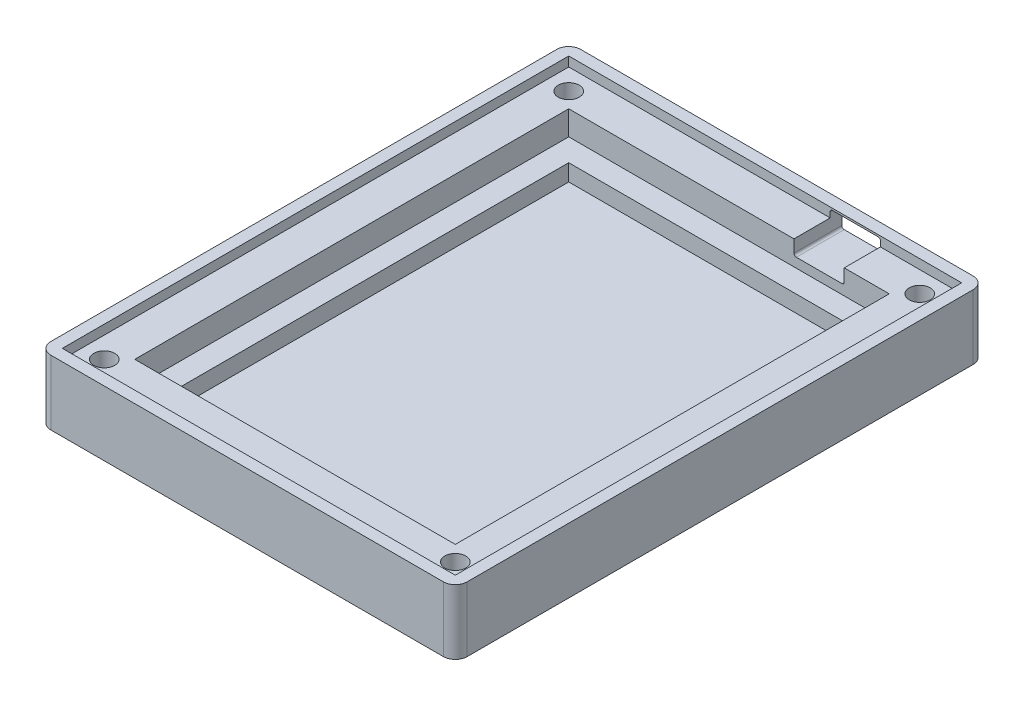
from build123d import *

# Parameters (mm, degrees)
SKETCH1_W                 = 87.375
SKETCH1_H                 = 111.187
FRAME_BLOCK_EXTRUDE_DEPTH = 13.6
SKETCH2_W                 = 82.475
SKETCH2_H                 = 106.287
ACRYLIC_CUT_DEPTH         = 2
SKETCH3_W                 = 67.275
SKETCH3_H                 = 91.087
PCB_CUT_DEPTH             = 5.1
SKETCH4_W                 = 57.875
SKETCH4_H                 = 81.687
PCB_PINS_CUT_DEPTH        = 3.5
SKETCH5_W                 = 10.55
SKETCH5_H                 = 4.7
PORT_CUT_DEPTH            = 20
SKETCH6_R                 = 2.2
HEATSET_INSERT_CUTS_DEPTH = 5
SKETCH7_R                 = 1.5
SCREW_CUT_DEPTH           = 5
CORNER_FILLET_R           = 2.5
PORT_FILLET_R             = 0.5
SKETCH9_W                 = 0.610576923
SKETCH9_H                 = 0.162820513
CUT_EXTRUDE1_DEPTH        = 0.5


with BuildPart() as part:
    # Sketch1 → Frame-Block-Extrude (new body)
    with BuildSketch(Plane(origin=(0, 0, 0), x_dir=(1, 0, 0), z_dir=(0, 1, 0))):
        with Locations((43.6875, 55.5935)):
            Rectangle(SKETCH1_W, SKETCH1_H)
    extrude(amount=FRAME_BLOCK_EXTRUDE_DEPTH)

    # Sketch2 → Acrylic-Cut (cut)
    with BuildSketch(Plane(origin=(0, 13.6, 0), x_dir=(1, 0, 0), z_dir=(0, 1, 0))):
        with Locations((43.6875, 55.5935)):
            Rectangle(SKETCH2_W, SKETCH2_H)
    extrude(amount=-ACRYLIC_CUT_DEPTH, mode=Mode.SUBTRACT)

    # Sketch3 → PCB-Cut (cut)
    with BuildSketch(Plane(origin=(0, 11.6, 0), x_dir=(1, 0, 0), z_dir=(0, 1, 0))):
        with Locations((43.6875, 55.5935)):
            Rectangle(SKETCH3_W, SKETCH3_H)
    extrude(amount=-PCB_CUT_DEPTH, mode=Mode.SUBTRACT)

    # Sketch4 → PCB-Pins-Cut (cut)
    with BuildSketch(Plane(origin=(0, 6.5, 0), x_dir=(1, 0, 0), z_dir=(0, 1, 0))):
        with Locations((43.6875, 55.5935)):
            Rectangle(SKETCH4_W, SKETCH4_H)
    extrude(amount=-PCB_PINS_CUT_DEPTH, mode=Mode.SUBTRACT)

    # Sketch5 → Port-Cut (cut)
    with BuildSketch(Plane(origin=(0, 0, -111.187), x_dir=(-1, 0, 0), z_dir=(0, 0, -1))):
        with Locations((-62.6, 10.85)):
            Rectangle(SKETCH5_W, SKETCH5_H)
    extrude(amount=-PORT_CUT_DEPTH, mode=Mode.SUBTRACT)

    # Sketch6 → Heatset-Insert-Cuts (cut)
    with BuildSketch(Plane(origin=(0, 11.6, 0), x_dir=(1, 0, 0), z_dir=(0, 1, 0))):
        with Locations((6.85, 104.337)):
            Circle(SKETCH6_R)
        with Locations((80.525, 104.337)):
            Circle(SKETCH6_R)
        with Locations((80.525, 6.85)):
            Circle(SKETCH6_R)
        with Locations((6.85, 6.85)):
            Circle(SKETCH6_R)
    extrude(amount=-HEATSET_INSERT_CUTS_DEPTH, mode=Mode.SUBTRACT)

    # Sketch7 → Screw-Cut (cut)
    with BuildSketch(Plane(origin=(0, 6.6, 0), x_dir=(1, 0, 0), z_dir=(0, 1, 0))):
        with Locations((80.525, 6.85)):
            Circle(SKETCH7_R)
        with Locations((6.85, 6.85)):
            Circle(SKETCH7_R)
        with Locations((6.85, 104.337)):
            Circle(SKETCH7_R)
        with Locations((80.525, 104.337)):
            Circle(SKETCH7_R)
    extrude(amount=-SCREW_CUT_DEPTH, mode=Mode.SUBTRACT)

    # Corner-Fillet
    corner_fillet_edges = [part.edges().sort_by_distance(p)[0] for p in [
        (87.375, 6.8, -111.187),
        (0, 6.8, -111.187),
        (0, 6.8, 0),
        (87.375, 6.8, 0),
    ]]
    fillet(corner_fillet_edges, radius=CORNER_FILLET_R)

    # Port-Fillet
    port_fillet_edges = [part.edges().sort_by_distance(p)[0] for p in [
        (67.875, 13.2, -109.962),
        (57.325, 13.2, -109.962),
        (57.325, 8.5, -106.162),
        (67.875, 8.5, -106.162),
    ]]
    fillet(port_fillet_edges, radius=PORT_FILLET_R)

    # Sketch9 → Cut-Extrude1 (cut)
    # profile 1 of 28: a face of its own
    with BuildSketch(Plane.ZY):
        with BuildLine():
            Line((-104.727104393, 9.292444241), (-104.727104393, 8.198837576))
            Line((-104.727104393, 8.198837576), (-103.981463485, 8.198837576))
            add(Edge.make_bspline(
                [(-103.981463485, 8.198837576), (-103.969005779, 8.198683217), (-103.946018022, 8.198398384), (-103.914441911, 8.192832385), (-103.888251332, 8.18459658), (-103.861541001, 8.169550839), (-103.836817031, 8.141312529), (-103.833828156, 8.113373499), (-103.832335303, 8.099418788)],
                knots=[0, 0, 0, 0, 1.109227365, 2.046817439, 2.849965025, 3.543015824, 4.772809742, 6, 6, 6, 6], degree=3))
            add(Edge.make_bspline(
                [(-103.832335303, 8.099418788), (-103.833958094, 8.086015986), (-103.837293739, 8.058466537), (-103.861631103, 8.030408449), (-103.888010448, 8.014077693), (-103.914479678, 8.00607274), (-103.946005823, 8.000417373), (-103.969001491, 8.00014669), (-103.981463485, 8)],
                knots=[0, 0, 0, 0, 1.185104068, 2.435980483, 3.142673719, 3.947895778, 4.88790758, 6, 6, 6, 6], degree=3))
            Line((-103.981463485, 8), (-105.174488938, 8))
            add(Edge.make_bspline(
                [(-105.174488938, 8), (-105.186954075, 8.000134987), (-105.209955546, 8.000384074), (-105.241687426, 8.00622041), (-105.268500511, 8.013913427), (-105.295053151, 8.030265863), (-105.318538683, 8.058742999), (-105.321948404, 8.086053189), (-105.32361712, 8.099418788)],
                knots=[0, 0, 0, 0, 1.11069315, 2.049522198, 2.87569642, 3.581500471, 4.816387068, 6, 6, 6, 6], degree=3))
            add(Edge.make_bspline(
                [(-105.32361712, 8.099418788), (-105.322076078, 8.11333329), (-105.319009069, 8.141026178), (-105.295135384, 8.169689051), (-105.268255733, 8.184752639), (-105.241725561, 8.192685479), (-105.209943352, 8.198431659), (-105.18694979, 8.198694912), (-105.174488938, 8.198837576)],
                knots=[0, 0, 0, 0, 1.225693308, 2.439396442, 3.131601845, 3.955679308, 4.892125692, 6, 6, 6, 6], degree=3))
            Line((-105.174488938, 8.198837576), (-104.925941969, 8.198837576))
            Line((-104.925941969, 8.198837576), (-104.925941969, 10.883144846))
            Line((-104.925941969, 10.883144846), (-105.174488938, 10.883144846))
            add(Edge.make_bspline(
                [(-105.174488938, 10.883144846), (-105.18694979, 10.88328751), (-105.209943352, 10.883550763), (-105.241725561, 10.889296943), (-105.268255733, 10.897229783), (-105.295135384, 10.912293371), (-105.319009069, 10.940956244), (-105.322076078, 10.968649132), (-105.32361712, 10.982563634)],
                knots=[0, 0, 0, 0, 1.107874308, 2.044320692, 2.868398155, 3.560603558, 4.774306692, 6, 6, 6, 6], degree=3))
            add(Edge.make_bspline(
                [(-105.32361712, 10.982563634), (-105.322076078, 10.996478136), (-105.319009069, 11.024171024), (-105.295135384, 11.052833897), (-105.268255733, 11.067897485), (-105.241725561, 11.075830325), (-105.209943352, 11.081576505), (-105.18694979, 11.081839758), (-105.174488938, 11.081982422)],
                knots=[0, 0, 0, 0, 1.225693308, 2.439396442, 3.131601845, 3.955679308, 4.892125692, 6, 6, 6, 6], degree=3))
            Line((-105.174488938, 11.081982422), (-103.934084218, 11.081982422))
            add(Edge.make_bspline(
                [(-103.934084218, 11.081982422), (-103.898320659, 11.081313955), (-103.828120686, 11.080001827), (-103.725395113, 11.067420183), (-103.627768015, 11.046230261), (-103.534935555, 11.017845501), (-103.447270892, 10.980190243), (-103.364847351, 10.934269268), (-103.287218954, 10.880244771), (-103.215721395, 10.818484736), (-103.151129033, 10.751338574), (-103.093524945, 10.68112766), (-103.045596534, 10.607554658), (-103.006144345, 10.531004914), (-102.974918294, 10.452031166), (-102.952958162, 10.369695379), (-102.940573181, 10.284420551), (-102.938577445, 10.226605334), (-102.937566213, 10.197310552)],
                knots=[0, 0, 0, 0, 1.156162647, 2.269421365, 3.340119316, 4.383494979, 5.403703518, 6.41940157, 7.42973678, 8.456827477, 9.469345849, 10.439580569, 11.389370093, 12.303046945, 13.220360832, 14.13019352, 15.052575162, 16, 16, 16, 16], degree=3))
            add(Edge.make_bspline(
                [(-102.937566213, 10.197310552), (-102.938408835, 10.163041519), (-102.940061651, 10.095822279), (-102.95903408, 9.998142479), (-102.987270357, 9.905072754), (-103.029060859, 9.819018093), (-103.077503013, 9.739607179), (-103.131230123, 9.668451945), (-103.189613079, 9.606080574), (-103.233060736, 9.571319173), (-103.254463599, 9.554195269)],
                knots=[0, 0, 0, 0, 1.105591113, 2.168634133, 3.202959426, 4.239311751, 5.249168503, 6.204343397, 7.115436948, 8, 8, 8, 8], degree=3))
            add(Edge.make_bspline(
                [(-103.254463599, 9.554195269), (-103.287290041, 9.531192702), (-103.351765846, 9.486012387), (-103.452536637, 9.427343198), (-103.555224984, 9.378717843), (-103.62575883, 9.353742883), (-103.660682552, 9.341376926)],
                knots=[0, 0, 0, 0, 1.044235375, 2.05102689, 3.034996692, 4, 4, 4, 4], degree=3))
            add(Edge.make_bspline(
                [(-103.660682552, 9.341376926), (-103.687472529, 9.333531038), (-103.74325524, 9.317194149), (-103.833797991, 9.303700396), (-103.932830274, 9.293943796), (-104.002146055, 9.292956994), (-104.038163262, 9.292444241)],
                knots=[0, 0, 0, 0, 0.875848207, 1.823711393, 2.869177608, 4, 4, 4, 4], degree=3))
            Line((-104.038163262, 9.292444241), (-104.727104393, 9.292444241))
        make_face()
        with BuildLine():
            Line((-104.727104393, 9.491281817), (-104.015638693, 9.491281817))
            add(Edge.make_bspline(
                [(-104.015638693, 9.491281817), (-103.974912548, 9.492391243), (-103.894279293, 9.494587784), (-103.775167227, 9.514771359), (-103.659676601, 9.547688876), (-103.549048793, 9.592017521), (-103.447653177, 9.646605814), (-103.359763238, 9.710918347), (-103.28744427, 9.783410816), (-103.231308651, 9.863345033), (-103.18972185, 9.946912528), (-103.159185914, 10.030496729), (-103.140190708, 10.114395472), (-103.137661531, 10.170290852), (-103.136403788, 10.198087262)],
                knots=[0, 0, 0, 0, 1.16821529, 2.312936869, 3.456186136, 4.609821798, 5.727176919, 6.752712281, 7.724839776, 8.652641874, 9.543303962, 10.396600962, 11.202640076, 12, 12, 12, 12], degree=3))
            add(Edge.make_bspline(
                [(-103.136403788, 10.198087262), (-103.136687647, 10.220898891), (-103.137248246, 10.265950056), (-103.146664878, 10.332506141), (-103.16399201, 10.39652118), (-103.18823186, 10.458246953), (-103.21947832, 10.517809135), (-103.258686249, 10.5748077), (-103.305694307, 10.62905094), (-103.358711097, 10.680849864), (-103.41766137, 10.727530802), (-103.479753457, 10.770462729), (-103.546942236, 10.804825671), (-103.616892077, 10.834087577), (-103.691011279, 10.855563024), (-103.768285372, 10.872108095), (-103.849714319, 10.881396554), (-103.905064781, 10.88255417), (-103.933307509, 10.883144846)],
                knots=[0, 0, 0, 0, 0.933755725, 1.844093709, 2.744432112, 3.644395712, 4.55516597, 5.493487178, 6.471192206, 7.49111959, 8.524574671, 9.548134247, 10.577445895, 11.609376384, 12.64950231, 13.733103402, 14.843309639, 16, 16, 16, 16], degree=3))
            Line((-103.933307509, 10.883144846), (-104.727104393, 10.883144846))
            Line((-104.727104393, 10.883144846), (-104.727104393, 9.491281817))
        make_face(mode=Mode.SUBTRACT)
    # profile 2 of 28: a face of its own
    with BuildSketch(Plane.ZY):
        with BuildLine():
            Line((-101.24744682, 10.286632119), (-101.24744682, 9.726624729))
            add(Edge.make_bspline(
                [(-101.24744682, 9.726624729), (-101.212288643, 9.757494481), (-101.144844024, 9.81671253), (-101.046843879, 9.901065175), (-100.955290185, 9.976584944), (-100.869974118, 10.042905399), (-100.792622446, 10.10175511), (-100.721319045, 10.150766057), (-100.657594709, 10.192375766), (-100.581953262, 10.233788938), (-100.494381633, 10.275401232), (-100.39166793, 10.308999049), (-100.293373636, 10.33212069), (-100.228782724, 10.334959436), (-100.197335874, 10.336341513)],
                knots=[0, 0, 0, 0, 1.358705114, 2.606430568, 3.754907715, 4.804715587, 5.744540774, 6.576697469, 7.317117496, 7.953184073, 9.080096786, 10.126236631, 11.087736133, 12, 12, 12, 12], degree=3))
            add(Edge.make_bspline(
                [(-100.197335874, 10.336341513), (-100.164533828, 10.334743158), (-100.099204633, 10.331559841), (-100.003592192, 10.304241666), (-99.911478844, 10.261369526), (-99.841454, 10.210963937), (-99.788268901, 10.168746074), (-99.754231039, 10.137137828), (-99.724242992, 10.108792975), (-99.700316944, 10.081619138), (-99.681169104, 10.056889535), (-99.668110808, 10.034067228), (-99.658020272, 10.013787791), (-99.657148479, 10.000119544), (-99.656746215, 9.993812721)],
                knots=[0, 0, 0, 0, 1.74608712, 3.477541278, 5.262330092, 7.138686572, 8.061477292, 8.882400937, 9.614603934, 10.260067474, 10.812280475, 11.276353001, 11.666093734, 12, 12, 12, 12], degree=3))
            add(Edge.make_bspline(
                [(-99.656746215, 9.993812721), (-99.658313171, 9.977887765), (-99.661383467, 9.94668438), (-99.687728966, 9.907216188), (-99.72703608, 9.881282468), (-99.757596983, 9.878139624), (-99.773252607, 9.87652962)],
                knots=[0, 0, 0, 0, 1.030926344, 2.01999876, 2.985692454, 4, 4, 4, 4], degree=3))
            add(Edge.make_bspline(
                [(-99.773252607, 9.87652962), (-99.781315981, 9.876958409), (-99.796747758, 9.87777903), (-99.816311983, 9.883827067), (-99.831956784, 9.894534928), (-99.846502727, 9.909448838), (-99.866004268, 9.92932027), (-99.879764844, 9.945300354), (-99.887428871, 9.954200548)],
                knots=[0, 0, 0, 0, 1.008912959, 1.930869272, 2.514864789, 3.36270326, 4.531143436, 6, 6, 6, 6], degree=3))
            add(Edge.make_bspline(
                [(-99.887428871, 9.954200548), (-99.902326548, 9.970870911), (-99.930152483, 10.002007877), (-99.971011533, 10.044295258), (-100.010680533, 10.075863994), (-100.057094027, 10.106788571), (-100.114509183, 10.131340751), (-100.161636334, 10.135512576), (-100.184131816, 10.137503938)],
                knots=[0, 0, 0, 0, 1.117853543, 2.087930885, 2.934843936, 3.645617329, 4.876168588, 6, 6, 6, 6], degree=3))
            add(Edge.make_bspline(
                [(-100.184131816, 10.137503938), (-100.209877412, 10.135703361), (-100.264490775, 10.131883853), (-100.349688573, 10.108665759), (-100.440991241, 10.069180647), (-100.523241151, 10.026667236), (-100.59613583, 9.980993089), (-100.661263236, 9.934512884), (-100.736470063, 9.878239392), (-100.820009805, 9.809803317), (-100.914497068, 9.732811429), (-101.016358303, 9.64260268), (-101.129374958, 9.543661583), (-101.206923306, 9.473039563), (-101.24744682, 9.436135458)],
                knots=[0, 0, 0, 0, 0.71580916, 1.518424602, 2.437570209, 3.476892299, 4.087686963, 4.826128659, 5.69945588, 6.697112841, 7.826354485, 9.085760827, 10.477140873, 12, 12, 12, 12], degree=3))
            Line((-101.24744682, 9.436135458), (-101.24744682, 8.198837576))
            Line((-101.24744682, 8.198837576), (-100.253258942, 8.198837576))
            add(Edge.make_bspline(
                [(-100.253258942, 8.198837576), (-100.240805879, 8.198659122), (-100.217571262, 8.198326169), (-100.18569264, 8.192944693), (-100.159294583, 8.184570806), (-100.132603995, 8.169717582), (-100.108741429, 8.141017391), (-100.105672678, 8.113330352), (-100.10413076, 8.099418788)],
                knots=[0, 0, 0, 0, 1.107723997, 2.06676398, 2.868823036, 3.560934523, 4.774472988, 6, 6, 6, 6], degree=3))
            add(Edge.make_bspline(
                [(-100.10413076, 8.099418788), (-100.105800253, 8.086055879), (-100.10921156, 8.058751185), (-100.132686579, 8.030237627), (-100.15905388, 8.014103191), (-100.185731455, 8.005962504), (-100.217558958, 8.000489338), (-100.240801585, 8.000170752), (-100.253258942, 8)],
                knots=[0, 0, 0, 0, 1.183451936, 2.418170563, 3.123878611, 3.927978125, 4.889457927, 6, 6, 6, 6], degree=3))
            Line((-100.253258942, 8), (-101.993087729, 8))
            add(Edge.make_bspline(
                [(-101.993087729, 8), (-102.005553442, 8.000134567), (-102.028555977, 8.000382878), (-102.060281084, 8.006224148), (-102.087115053, 8.013901951), (-102.113413811, 8.030205889), (-102.13750094, 8.058261034), (-102.140648839, 8.085739564), (-102.14221591, 8.099418788)],
                knots=[0, 0, 0, 0, 1.109861809, 2.047988156, 2.873543996, 3.578819762, 4.794700252, 6, 6, 6, 6], degree=3))
            add(Edge.make_bspline(
                [(-102.14221591, 8.099418788), (-102.140559956, 8.112791932), (-102.13722172, 8.139750828), (-102.114211963, 8.167744552), (-102.088388837, 8.184196663), (-102.061750664, 8.19295146), (-102.029297502, 8.198347333), (-102.005801227, 8.198665448), (-101.993087729, 8.198837576)],
                knots=[0, 0, 0, 0, 1.183366628, 2.385546471, 3.071624894, 3.905032546, 4.866443041, 6, 6, 6, 6], degree=3))
            Line((-101.993087729, 8.198837576), (-101.446284396, 8.198837576))
            Line((-101.446284396, 8.198837576), (-101.446284396, 10.087794544))
            Line((-101.446284396, 10.087794544), (-101.843959547, 10.087794544))
            add(Edge.make_bspline(
                [(-101.843959547, 10.087794544), (-101.856420398, 10.087937208), (-101.87941396, 10.088200461), (-101.91119617, 10.093946641), (-101.937726341, 10.101879481), (-101.964605992, 10.116943069), (-101.988479678, 10.145605942), (-101.991546687, 10.173298829), (-101.993087729, 10.187213332)],
                knots=[0, 0, 0, 0, 1.107874308, 2.044320692, 2.868398155, 3.560603558, 4.774306692, 6, 6, 6, 6], degree=3))
            add(Edge.make_bspline(
                [(-101.993087729, 10.187213332), (-101.991431774, 10.200586476), (-101.988093539, 10.227545372), (-101.965083782, 10.255539095), (-101.939260656, 10.271991207), (-101.912622482, 10.280746004), (-101.88016932, 10.286141877), (-101.856673045, 10.286459992), (-101.843959547, 10.286632119)],
                knots=[0, 0, 0, 0, 1.183366628, 2.385546471, 3.071624894, 3.905032546, 4.866443041, 6, 6, 6, 6], degree=3))
            Line((-101.843959547, 10.286632119), (-101.24744682, 10.286632119))
        make_face()
    # profile 3 of 28: a face of its own
    with BuildSketch(Plane.ZY):
        with BuildLine():
            Line((-96.574763793, 9.093606666), (-98.761977125, 9.093606666))
            add(Edge.make_bspline(
                [(-98.761977125, 9.093606666), (-98.75656394, 9.058811951), (-98.74593625, 8.990499582), (-98.72100101, 8.891386344), (-98.688197554, 8.797948758), (-98.648564574, 8.709355208), (-98.600726327, 8.626222265), (-98.546805446, 8.547239977), (-98.483674699, 8.474973396), (-98.41514348, 8.407284621), (-98.339855584, 8.347147709), (-98.260209732, 8.293931417), (-98.176310366, 8.248252287), (-98.086948842, 8.213240154), (-97.994512795, 8.183797652), (-97.897382091, 8.164068618), (-97.796108792, 8.151012652), (-97.726925409, 8.149764302), (-97.691671737, 8.149128182)],
                knots=[0, 0, 0, 0, 1.075737692, 2.111992843, 3.117930531, 4.098850537, 5.073367603, 6.045665871, 7.016288651, 8.001030438, 8.985867579, 9.955812899, 10.925758218, 11.898410547, 12.884422969, 13.886869539, 14.923215304, 16, 16, 16, 16], degree=3))
            add(Edge.make_bspline(
                [(-97.691671737, 8.149128182), (-97.651239077, 8.150278634), (-97.569056308, 8.152617025), (-97.444336097, 8.168721423), (-97.316999246, 8.195467371), (-97.189129371, 8.231226767), (-97.065849852, 8.276079113), (-96.952396598, 8.328936987), (-96.849928376, 8.387163638), (-96.790188518, 8.433971419), (-96.76117402, 8.456705056)],
                knots=[0, 0, 0, 0, 0.973173784, 1.978057237, 3.02184196, 4.103021554, 5.171627183, 6.175350486, 7.113802877, 8, 8, 8, 8], degree=3))
            add(Edge.make_bspline(
                [(-96.76117402, 8.456705056), (-96.746605596, 8.468388431), (-96.721395373, 8.488606162), (-96.689835034, 8.494574549), (-96.676512709, 8.497093939)],
                knots=[0, 0, 0, 0, 1.155755307, 2, 2, 2, 2], degree=3))
            add(Edge.make_bspline(
                [(-96.676512709, 8.497093939), (-96.663335846, 8.49570895), (-96.6362466, 8.492861664), (-96.604400062, 8.46521961), (-96.579137512, 8.43109504), (-96.576211398, 8.403020409), (-96.574763793, 8.389131349)],
                knots=[0, 0, 0, 0, 0.953263241, 1.959736834, 2.990642522, 4, 4, 4, 4], degree=3))
            add(Edge.make_bspline(
                [(-96.574763793, 8.389131349), (-96.576890629, 8.374069389), (-96.58148176, 8.341555618), (-96.603392212, 8.316917742), (-96.615152676, 8.303693328)],
                knots=[0, 0, 0, 0, 0.926497301, 2, 2, 2, 2], degree=3))
            add(Edge.make_bspline(
                [(-96.615152676, 8.303693328), (-96.638587342, 8.281643829), (-96.68981128, 8.233447615), (-96.78855795, 8.173899343), (-96.90906079, 8.11508281), (-97.049136782, 8.059328981), (-97.201818111, 8.011050417), (-97.360341536, 7.976084838), (-97.520962005, 7.95427732), (-97.628949018, 7.95162255), (-97.683127935, 7.950290606)],
                knots=[0, 0, 0, 0, 0.671328047, 1.467401588, 2.397240231, 3.476078146, 4.616591022, 5.74240902, 6.867328276, 8, 8, 8, 8], degree=3))
            add(Edge.make_bspline(
                [(-97.683127935, 7.950290606), (-97.727713965, 7.951245288), (-97.815414301, 7.953123138), (-97.944205666, 7.970626514), (-98.067381744, 7.999511185), (-98.185292525, 8.038815649), (-98.296923259, 8.090751059), (-98.403285921, 8.15310494), (-98.503861763, 8.227183379), (-98.596961032, 8.312341182), (-98.681783516, 8.404991925), (-98.757347522, 8.502784003), (-98.819158464, 8.606844586), (-98.871199575, 8.714782036), (-98.911559664, 8.827503365), (-98.940453769, 8.945103222), (-98.957959648, 9.067443932), (-98.959853955, 9.150766373), (-98.960814701, 9.193025454)],
                knots=[0, 0, 0, 0, 1.076368113, 2.117206831, 3.131873005, 4.128441076, 5.113228805, 6.099821284, 7.101554577, 8.124051088, 9.141929608, 10.132398072, 11.102868707, 12.059359825, 13.022551524, 13.988580437, 14.979857777, 16, 16, 16, 16], degree=3))
            add(Edge.make_bspline(
                [(-98.960814701, 9.193025454), (-98.959835285, 9.231668469), (-98.95790686, 9.307754878), (-98.940670471, 9.419514208), (-98.914860162, 9.52756543), (-98.876228769, 9.630907461), (-98.827882127, 9.730460314), (-98.768496765, 9.825249371), (-98.698797441, 9.916251269), (-98.618687096, 10.001313548), (-98.530725282, 10.079552237), (-98.436405132, 10.147977787), (-98.337388746, 10.206921793), (-98.232869849, 10.254347841), (-98.123218924, 10.290959907), (-98.008825602, 10.317398425), (-97.889135971, 10.333159657), (-97.807707618, 10.335267818), (-97.766235828, 10.336341513)],
                knots=[0, 0, 0, 0, 1.006760736, 1.982267942, 2.941529292, 3.898175227, 4.85203144, 5.82215359, 6.808966086, 7.835598058, 8.863560324, 9.873370659, 10.868846728, 11.862559452, 12.859293142, 13.877638503, 14.919072712, 16, 16, 16, 16], degree=3))
            add(Edge.make_bspline(
                [(-97.766235828, 10.336341513), (-97.723723231, 10.335333225), (-97.640187495, 10.333351976), (-97.517658498, 10.316663792), (-97.400964752, 10.289437887), (-97.289685622, 10.252481893), (-97.184950376, 10.202913722), (-97.086101026, 10.142644276), (-96.991937419, 10.072728148), (-96.906040213, 9.99097189), (-96.826453885, 9.902396596), (-96.757927942, 9.805561482), (-96.700333597, 9.702282965), (-96.652337452, 9.593303775), (-96.616915013, 9.477145705), (-96.591286297, 9.355015758), (-96.576212718, 9.226289413), (-96.575253351, 9.138437082), (-96.574763793, 9.093606666)],
                knots=[0, 0, 0, 0, 1.054364465, 2.071788511, 3.061149489, 4.023944596, 4.975034273, 5.929004307, 6.892484799, 7.87858772, 8.865945012, 9.842609915, 10.81461695, 11.795518117, 12.79101102, 13.821489828, 14.888321825, 16, 16, 16, 16], degree=3))
        make_face()
        with BuildLine():
            add(Edge.make_bspline(
                [(-96.773601369, 9.292444241), (-96.779580907, 9.323109657), (-96.791348688, 9.383459452), (-96.817317611, 9.471052141), (-96.849764984, 9.554352112), (-96.889598588, 9.632986756), (-96.935816054, 9.707145021), (-96.987762144, 9.777506005), (-97.047167064, 9.842681724), (-97.112309848, 9.903321582), (-97.182505692, 9.957718547), (-97.25574188, 10.006678603), (-97.333069099, 10.047259862), (-97.413961438, 10.079537303), (-97.497800686, 10.105551263), (-97.584844423, 10.124180259), (-97.675339809, 10.135135773), (-97.736691199, 10.136707337), (-97.767789247, 10.137503938)],
                knots=[0, 0, 0, 0, 1.05293324, 2.072181507, 3.075606656, 4.063302385, 5.039512889, 6.0189575, 7.007809826, 8.008459244, 9.016014746, 9.998992956, 10.97516443, 11.954258871, 12.931717527, 13.931605125, 14.951563396, 16, 16, 16, 16], degree=3))
            add(Edge.make_bspline(
                [(-97.767789247, 10.137503938), (-97.798891986, 10.136730591), (-97.860252631, 10.135204904), (-97.95062766, 10.123921263), (-98.037868537, 10.106539692), (-98.121431288, 10.080456298), (-98.201742624, 10.047762342), (-98.279147481, 10.008060246), (-98.352873871, 9.960535447), (-98.422719453, 9.906135771), (-98.487468224, 9.846118491), (-98.546302448, 9.780778276), (-98.599476936, 9.711435003), (-98.643967407, 9.6359139), (-98.684602992, 9.557357202), (-98.716468964, 9.473205872), (-98.743633463, 9.384830899), (-98.755782179, 9.323644683), (-98.761977125, 9.292444241)],
                knots=[0, 0, 0, 0, 1.047776857, 2.067093301, 3.064560267, 4.04140384, 5.011798498, 5.983329703, 6.968242653, 7.962920778, 8.962940519, 9.938848717, 10.922911304, 11.901389633, 12.888463837, 13.899383298, 14.928840965, 16, 16, 16, 16], degree=3))
            Line((-98.761977125, 9.292444241), (-96.773601369, 9.292444241))
        make_face(mode=Mode.SUBTRACT)
    # profile 4 of 28: a face of its own
    with BuildSketch(Plane.ZY):
        with BuildLine():
            add(Edge.make_bspline(
                [(-93.741328341, 10.137503938), (-93.741168779, 10.149707254), (-93.740871481, 10.172444672), (-93.735244485, 10.20369839), (-93.727282314, 10.23021791), (-93.710802614, 10.256369931), (-93.684047681, 10.281782316), (-93.656667977, 10.285054144), (-93.643462972, 10.286632119)],
                knots=[0, 0, 0, 0, 1.097880573, 2.045588953, 2.857403966, 3.569883428, 4.827974841, 6, 6, 6, 6], degree=3))
            add(Edge.make_bspline(
                [(-93.643462972, 10.286632119), (-93.629144802, 10.285263235), (-93.600567223, 10.282531083), (-93.573054362, 10.256356289), (-93.556183674, 10.229828009), (-93.548677883, 10.202075418), (-93.542888226, 10.169083782), (-93.542630181, 10.145051198), (-93.542490765, 10.132066973)],
                knots=[0, 0, 0, 0, 1.212429937, 2.41988408, 3.103686758, 3.925447464, 4.879169338, 6, 6, 6, 6], degree=3))
            Line((-93.542490765, 10.132066973), (-93.542490765, 9.742158914))
            add(Edge.make_bspline(
                [(-93.542490765, 9.742158914), (-93.542653515, 9.729699364), (-93.542957169, 9.706452643), (-93.548568141, 9.674408424), (-93.556596191, 9.647208121), (-93.572493641, 9.620277167), (-93.600932428, 9.594965949), (-93.629210117, 9.592130009), (-93.643462972, 9.590700605)],
                knots=[0, 0, 0, 0, 1.091244991, 2.036017858, 2.847725827, 3.56061575, 4.770472714, 6, 6, 6, 6], degree=3))
            add(Edge.make_bspline(
                [(-93.643462972, 9.590700605), (-93.655954125, 9.592270659), (-93.680925606, 9.595409407), (-93.714704445, 9.619989783), (-93.735365927, 9.663907874), (-93.739660106, 9.698427024), (-93.74210505, 9.718080927)],
                knots=[0, 0, 0, 0, 0.835455073, 1.670186182, 2.673491816, 4, 4, 4, 4], degree=3))
            add(Edge.make_bspline(
                [(-93.74210505, 9.718080927), (-93.746210516, 9.744358345), (-93.754377171, 9.796629776), (-93.790672976, 9.868813401), (-93.843460455, 9.933820657), (-93.889071965, 9.968084725), (-93.912981092, 9.986045628)],
                knots=[0, 0, 0, 0, 0.966587398, 1.922750053, 2.911125017, 4, 4, 4, 4], degree=3))
            add(Edge.make_bspline(
                [(-93.912981092, 9.986045628), (-93.932405397, 9.998411619), (-93.971683668, 10.023417135), (-94.03631031, 10.053014916), (-94.104251697, 10.079888286), (-94.17752242, 10.100450256), (-94.254683895, 10.117836574), (-94.337052243, 10.129124879), (-94.423669022, 10.136239251), (-94.483070852, 10.137076684), (-94.513377365, 10.137503938)],
                knots=[0, 0, 0, 0, 0.878838616, 1.777116947, 2.71039402, 3.668405487, 4.681334707, 5.730615818, 6.842171663, 8, 8, 8, 8], degree=3))
            add(Edge.make_bspline(
                [(-94.513377365, 10.137503938), (-94.544979767, 10.137104464), (-94.606453375, 10.1363274), (-94.695859759, 10.128947105), (-94.779971342, 10.118519675), (-94.858635088, 10.103018212), (-94.931923324, 10.082945888), (-94.999770253, 10.058092429), (-95.062246496, 10.028781538), (-95.100505408, 10.005295365), (-95.119210603, 9.993812721)],
                knots=[0, 0, 0, 0, 1.201193755, 2.336585495, 3.408510286, 4.421944094, 5.381914604, 6.294333722, 7.166081328, 8, 8, 8, 8], degree=3))
            add(Edge.make_bspline(
                [(-95.119210603, 9.993812721), (-95.143864552, 9.976109072), (-95.189463005, 9.943365473), (-95.241822603, 9.883465935), (-95.276412763, 9.819806691), (-95.280384338, 9.774387406), (-95.282319552, 9.752256135)],
                knots=[0, 0, 0, 0, 1.196622844, 2.213201291, 3.129353801, 4, 4, 4, 4], degree=3))
            add(Edge.make_bspline(
                [(-95.282319552, 9.752256135), (-95.281778809, 9.739756076), (-95.280715215, 9.715169591), (-95.270464441, 9.679415977), (-95.255873711, 9.644898877), (-95.234668278, 9.611993385), (-95.206531823, 9.581542825), (-95.17333843, 9.551843568), (-95.133073373, 9.52499059), (-95.104040153, 9.508443663), (-95.088918941, 9.499825619)],
                knots=[0, 0, 0, 0, 0.893068833, 1.756585484, 2.64521644, 3.570984259, 4.542592539, 5.606580725, 6.753448694, 8, 8, 8, 8], degree=3))
            add(Edge.make_bspline(
                [(-95.088918941, 9.499825619), (-95.07660121, 9.493861375), (-95.050191524, 9.481073807), (-95.005261127, 9.466452085), (-94.953798141, 9.450201477), (-94.894485506, 9.436880063), (-94.827539976, 9.424645405), (-94.753589372, 9.411958721), (-94.671918346, 9.40143808), (-94.615135965, 9.395138544), (-94.585611328, 9.391863029)],
                knots=[0, 0, 0, 0, 0.634506646, 1.360406523, 2.189132044, 3.13937357, 4.178742232, 5.348270263, 6.621203341, 8, 8, 8, 8], degree=3))
            add(Edge.make_bspline(
                [(-94.585611328, 9.391863029), (-94.546763622, 9.38783998), (-94.472364567, 9.380135251), (-94.365890996, 9.367205286), (-94.269251058, 9.352413564), (-94.181908864, 9.340479274), (-94.104679482, 9.325005143), (-94.037138194, 9.310859069), (-93.979362148, 9.295377235), (-93.944521641, 9.283787849), (-93.928515277, 9.278463474)],
                knots=[0, 0, 0, 0, 1.403050263, 2.687047024, 3.852447237, 4.915276735, 5.852870827, 6.681121621, 7.394083255, 8, 8, 8, 8], degree=3))
            add(Edge.make_bspline(
                [(-93.928515277, 9.278463474), (-93.889753555, 9.262581114), (-93.815295256, 9.232072317), (-93.714724903, 9.172801583), (-93.630249191, 9.103925262), (-93.562223437, 9.026258841), (-93.509064397, 8.943137624), (-93.47120341, 8.855548273), (-93.447654243, 8.764474092), (-93.444602984, 8.702282312), (-93.443071978, 8.671076818)],
                knots=[0, 0, 0, 0, 1.210209231, 2.324719167, 3.36193825, 4.348669712, 5.297847439, 6.20326102, 7.098464012, 8, 8, 8, 8], degree=3))
            add(Edge.make_bspline(
                [(-93.443071978, 8.671076818), (-93.443669172, 8.647960652), (-93.444860244, 8.601856681), (-93.459093709, 8.534189517), (-93.479705217, 8.467855748), (-93.510900911, 8.404256782), (-93.548723672, 8.341388433), (-93.596787362, 8.281915645), (-93.652497734, 8.223799369), (-93.716466595, 8.168349846), (-93.788906899, 8.116725364), (-93.869590242, 8.071788523), (-93.958605678, 8.034527587), (-94.055205395, 8.003373202), (-94.160002375, 7.979648478), (-94.272694827, 7.962947585), (-94.393011172, 7.951500415), (-94.476066902, 7.950701695), (-94.51881433, 7.950290606)],
                knots=[0, 0, 0, 0, 0.769967374, 1.535659278, 2.297786284, 3.082106434, 3.892440419, 4.740959669, 5.626776606, 6.575862772, 7.560901308, 8.589476767, 9.649945559, 10.775368402, 11.97180658, 13.230067571, 14.574361005, 16, 16, 16, 16], degree=3))
            add(Edge.make_bspline(
                [(-94.51881433, 7.950290606), (-94.561821813, 7.950991502), (-94.646187361, 7.952366413), (-94.76939101, 7.964430692), (-94.88678932, 7.982720344), (-94.998190699, 8.009207271), (-95.104073356, 8.043111605), (-95.203605208, 8.085438679), (-95.297784318, 8.133843473), (-95.355438598, 8.173120018), (-95.384068467, 8.192623901)],
                knots=[0, 0, 0, 0, 1.12999182, 2.216646295, 3.250241678, 4.250350897, 5.222931795, 6.168186722, 7.090361103, 8, 8, 8, 8], degree=3))
            add(Edge.make_bspline(
                [(-95.384068467, 8.192623901), (-95.384281925, 8.177869411), (-95.384664042, 8.151456934), (-95.385765778, 8.115888495), (-95.388903579, 8.088964642), (-95.393114823, 8.064088343), (-95.406055785, 8.040657862), (-95.426363095, 8.018433695), (-95.453022289, 8.002607958), (-95.472941759, 8.000858137), (-95.482710546, 8)],
                knots=[0, 0, 0, 0, 1.447965982, 2.592049428, 3.486801204, 4.109465429, 5.052312567, 6.058703012, 7.047960779, 8, 8, 8, 8], degree=3))
            add(Edge.make_bspline(
                [(-95.482710546, 8), (-95.495835032, 8.001666501), (-95.522714172, 8.005079519), (-95.550420598, 8.028784337), (-95.566303319, 8.054715585), (-95.57466443, 8.080791452), (-95.58007802, 8.1118745), (-95.580402021, 8.134600738), (-95.580575915, 8.146798054)],
                knots=[0, 0, 0, 0, 1.182251204, 2.421267757, 3.139963678, 3.936563064, 4.892540301, 6, 6, 6, 6], degree=3))
            Line((-95.580575915, 8.146798054), (-95.580575915, 8.598842855))
            add(Edge.make_bspline(
                [(-95.580575915, 8.598842855), (-95.580428687, 8.611046808), (-95.580154368, 8.633785412), (-95.574439423, 8.664710235), (-95.567093131, 8.690817183), (-95.552152866, 8.717142548), (-95.523767132, 8.74086184), (-95.496356145, 8.744052534), (-95.482710546, 8.745640909)],
                knots=[0, 0, 0, 0, 1.10257332, 2.054332556, 2.840110669, 3.543635075, 4.777184788, 6, 6, 6, 6], degree=3))
            add(Edge.make_bspline(
                [(-95.482710546, 8.745640909), (-95.469020265, 8.744331412), (-95.441790052, 8.7417268), (-95.408688615, 8.714284182), (-95.384396809, 8.676049123), (-95.382656592, 8.6448307), (-95.38173834, 8.628357807)],
                knots=[0, 0, 0, 0, 0.935988448, 1.861697698, 2.871691065, 4, 4, 4, 4], degree=3))
            add(Edge.make_bspline(
                [(-95.38173834, 8.628357807), (-95.38088114, 8.609678803), (-95.379213344, 8.573336319), (-95.369543409, 8.520992286), (-95.351491778, 8.473530703), (-95.334283811, 8.44559723), (-95.325815272, 8.43185036)],
                knots=[0, 0, 0, 0, 1.081469007, 2.104141656, 3.06699322, 4, 4, 4, 4], degree=3))
            add(Edge.make_bspline(
                [(-95.325815272, 8.43185036), (-95.30995378, 8.411746253), (-95.2764796, 8.369318432), (-95.208555856, 8.316709517), (-95.126902083, 8.268328937), (-95.030454163, 8.226058717), (-94.920658494, 8.191370787), (-94.798238849, 8.167140572), (-94.664743162, 8.15111206), (-94.571681256, 8.149805163), (-94.523474586, 8.149128182)],
                knots=[0, 0, 0, 0, 0.696620402, 1.470151637, 2.325627388, 3.284059664, 4.33652932, 5.461692062, 6.685140027, 8, 8, 8, 8], degree=3))
            add(Edge.make_bspline(
                [(-94.523474586, 8.149128182), (-94.487468611, 8.149461374), (-94.417696364, 8.150107031), (-94.316617233, 8.158304951), (-94.222567149, 8.170017284), (-94.135753826, 8.188324105), (-94.055700126, 8.210120995), (-93.983237173, 8.238244539), (-93.917673993, 8.270915801), (-93.860059681, 8.309151757), (-93.808474163, 8.349311155), (-93.764779257, 8.391355795), (-93.726208975, 8.432531837), (-93.696328811, 8.47560365), (-93.671205735, 8.518557307), (-93.654535113, 8.562709776), (-93.643429416, 8.60735626), (-93.642418065, 8.637353192), (-93.641909553, 8.652435795)],
                knots=[0, 0, 0, 0, 1.549650195, 3.002906477, 4.363308149, 5.626790885, 6.819461424, 7.930988745, 8.967803335, 9.96634761, 10.90287417, 11.77802778, 12.575022868, 13.326528888, 14.030227016, 14.711226438, 15.35199837, 16, 16, 16, 16], degree=3))
            add(Edge.make_bspline(
                [(-93.641909553, 8.652435795), (-93.642385654, 8.669328456), (-93.643317727, 8.702399634), (-93.654301053, 8.750619085), (-93.670130025, 8.796685869), (-93.693884629, 8.839718588), (-93.724193753, 8.879713259), (-93.759818245, 8.918123784), (-93.803195161, 8.953254939), (-93.835595425, 8.973560477), (-93.852397768, 8.984090657)],
                knots=[0, 0, 0, 0, 0.980783261, 1.920103564, 2.863279482, 3.806816056, 4.76466753, 5.776861986, 6.847110412, 8, 8, 8, 8], degree=3))
            add(Edge.make_bspline(
                [(-93.852397768, 8.984090657), (-93.871144715, 8.994243262), (-93.910201022, 9.015394614), (-93.974117673, 9.041957413), (-94.044555503, 9.06710889), (-94.121873411, 9.089294282), (-94.206355327, 9.108947065), (-94.297807354, 9.124377253), (-94.395798941, 9.139876097), (-94.498339654, 9.150297026), (-94.60021039, 9.160539321), (-94.696263322, 9.172286163), (-94.784447521, 9.184170076), (-94.864188536, 9.198987137), (-94.936762478, 9.211284146), (-95.000967675, 9.226139976), (-95.057254497, 9.241544606), (-95.120498731, 9.26274416), (-95.190083357, 9.29407752), (-95.264919697, 9.338863984), (-95.329219279, 9.393291903), (-95.383794761, 9.454638439), (-95.427355168, 9.521636581), (-95.45776018, 9.592689381), (-95.477671073, 9.66573792), (-95.479993959, 9.715624925), (-95.481157127, 9.740605496)],
                knots=[0, 0, 0, 0, 0.790542128, 1.646969875, 2.564514339, 3.564673582, 4.629534169, 5.780830965, 7.004847758, 8.309613862, 9.603799936, 10.803605024, 11.899889708, 12.904283813, 13.812427683, 14.630333853, 15.34814002, 15.976936199, 17.103441403, 18.172625788, 19.202063279, 20.215966652, 21.209832613, 22.152035841, 23.074644802, 24, 24, 24, 24], degree=3))
            add(Edge.make_bspline(
                [(-95.481157127, 9.740605496), (-95.480241506, 9.762938221), (-95.478446845, 9.806711409), (-95.464848045, 9.870650265), (-95.442298169, 9.931002027), (-95.409915485, 9.987344073), (-95.368837557, 10.039845208), (-95.319310927, 10.089159492), (-95.260726158, 10.135139681), (-95.193204227, 10.176168199), (-95.120304527, 10.213915239), (-95.042802712, 10.24652595), (-94.962201009, 10.274631968), (-94.877971213, 10.296833556), (-94.790672287, 10.315113513), (-94.699526188, 10.327032653), (-94.604922437, 10.335278621), (-94.540580811, 10.335983785), (-94.5079404, 10.336341513)],
                knots=[0, 0, 0, 0, 0.849861915, 1.665769184, 2.476898039, 3.293698149, 4.129783371, 5.008099916, 5.948817669, 6.958255866, 8.012018092, 9.072170577, 10.157104898, 11.259500228, 12.386653945, 13.550792776, 14.757520802, 16, 16, 16, 16], degree=3))
            add(Edge.make_bspline(
                [(-94.5079404, 10.336341513), (-94.469602967, 10.335773306), (-94.394622704, 10.334662006), (-94.284892941, 10.325157454), (-94.180565468, 10.309813887), (-94.081639181, 10.288133473), (-93.988118049, 10.260209316), (-93.900225055, 10.226151842), (-93.81774069, 10.185673835), (-93.766696266, 10.153495729), (-93.741328341, 10.137503938)],
                knots=[0, 0, 0, 0, 1.144844297, 2.239083859, 3.286731343, 4.2923573, 5.261127218, 6.19881588, 7.10485219, 8, 8, 8, 8], degree=3))
        make_face()
    # profile 5 of 28: a face of its own
    with BuildSketch(Plane.ZY):
        with BuildLine():
            Line((-91.752952585, 10.286632119), (-90.559927131, 10.286632119))
            add(Edge.make_bspline(
                [(-90.559927131, 10.286632119), (-90.547463973, 10.286486326), (-90.524466154, 10.286217297), (-90.492953589, 10.280551482), (-90.466443201, 10.272578193), (-90.440565298, 10.256334063), (-90.415020154, 10.229155419), (-90.412211805, 10.201251527), (-90.41079895, 10.187213332)],
                knots=[0, 0, 0, 0, 1.110312035, 2.048818941, 2.852751893, 3.558313761, 4.771609721, 6, 6, 6, 6], degree=3))
            add(Edge.make_bspline(
                [(-90.41079895, 10.187213332), (-90.41242174, 10.17381053), (-90.415757385, 10.146261081), (-90.440094749, 10.118202993), (-90.466474094, 10.101872237), (-90.492943324, 10.093867284), (-90.52446947, 10.088211916), (-90.547465138, 10.087941234), (-90.559927131, 10.087794544)],
                knots=[0, 0, 0, 0, 1.185104068, 2.435980483, 3.142673719, 3.947895778, 4.88790758, 6, 6, 6, 6], degree=3))
            Line((-90.559927131, 10.087794544), (-91.752952585, 10.087794544))
            Line((-91.752952585, 10.087794544), (-91.752952585, 8.60350311))
            add(Edge.make_bspline(
                [(-91.752952585, 8.60350311), (-91.75130512, 8.572196584), (-91.748089524, 8.511091089), (-91.718338083, 8.423782523), (-91.670902261, 8.344735242), (-91.616359507, 8.287345009), (-91.564334144, 8.247361533), (-91.519822499, 8.221216766), (-91.471419789, 8.198181345), (-91.417957879, 8.180906307), (-91.360779964, 8.165826561), (-91.29888265, 8.155842259), (-91.232901212, 8.150809956), (-91.187515932, 8.149698833), (-91.164206951, 8.149128182)],
                knots=[0, 0, 0, 0, 1.343723293, 2.622739907, 3.922123465, 5.285702538, 6.001058015, 6.740562597, 7.503208094, 8.303038636, 9.15429968, 10.046365558, 10.996652061, 12, 12, 12, 12], degree=3))
            add(Edge.make_bspline(
                [(-91.164206951, 8.149128182), (-91.127161066, 8.149977828), (-91.051368585, 8.151716125), (-90.935661256, 8.162940432), (-90.815609219, 8.181718635), (-90.694467046, 8.207903149), (-90.577703602, 8.237783266), (-90.472251671, 8.271124824), (-90.380146135, 8.305335799), (-90.325420839, 8.332760731), (-90.299729523, 8.345635629)],
                knots=[0, 0, 0, 0, 0.99521743, 2.036123518, 3.120170888, 4.257869472, 5.364529357, 6.356606562, 7.228493152, 8, 8, 8, 8], degree=3))
            add(Edge.make_bspline(
                [(-90.299729523, 8.345635629), (-90.284620086, 8.354632807), (-90.258246489, 8.370337425), (-90.227990529, 8.374798623), (-90.215068211, 8.376704001)],
                knots=[0, 0, 0, 0, 1.145800181, 2, 2, 2, 2], degree=3))
            add(Edge.make_bspline(
                [(-90.215068211, 8.376704001), (-90.201681896, 8.375565246), (-90.174847171, 8.373282455), (-90.142597748, 8.348333217), (-90.116826664, 8.316949758), (-90.113963099, 8.290437164), (-90.112542586, 8.277285213)],
                knots=[0, 0, 0, 0, 1.002752872, 2.010157115, 3.012909987, 4, 4, 4, 4], degree=3))
            add(Edge.make_bspline(
                [(-90.112542586, 8.277285213), (-90.114096937, 8.265409807), (-90.117470178, 8.239637885), (-90.135462636, 8.220699831), (-90.145164376, 8.210488215)],
                knots=[0, 0, 0, 0, 0.921577019, 2, 2, 2, 2], degree=3))
            add(Edge.make_bspline(
                [(-90.145164376, 8.210488215), (-90.153060387, 8.203841336), (-90.170415334, 8.189231906), (-90.202143615, 8.169304309), (-90.240408509, 8.148517998), (-90.286734931, 8.128446208), (-90.339427979, 8.106847755), (-90.399908604, 8.085155405), (-90.467170164, 8.062656866), (-90.565708165, 8.032997074), (-90.69217447, 8.000294296), (-90.84362469, 7.971431192), (-90.992112431, 7.953350049), (-91.090111772, 7.951302958), (-91.138575545, 7.950290606)],
                knots=[0, 0, 0, 0, 0.357006936, 0.784679304, 1.294079473, 1.863870682, 2.531408442, 3.265894212, 4.087991205, 4.986990368, 6.828574561, 8.607837376, 10.322468317, 12, 12, 12, 12], degree=3))
            add(Edge.make_bspline(
                [(-91.138575545, 7.950290606), (-91.168889477, 7.950901735), (-91.227829111, 7.952089957), (-91.313983506, 7.960901512), (-91.395292149, 7.974571321), (-91.472295249, 7.994004305), (-91.544333213, 8.019485958), (-91.611620222, 8.050809472), (-91.674387479, 8.087286239), (-91.731524697, 8.130213203), (-91.783731221, 8.176932389), (-91.828242571, 8.229042583), (-91.866726055, 8.284231142), (-91.897907559, 8.34374715), (-91.922373774, 8.407312221), (-91.93877737, 8.474975089), (-91.950573145, 8.546136013), (-91.951378761, 8.594907962), (-91.95179016, 8.619814005)],
                knots=[0, 0, 0, 0, 1.225534202, 2.382816441, 3.498047136, 4.556819277, 5.589867991, 6.582779716, 7.554099579, 8.519307605, 9.467851634, 10.380777527, 11.283866936, 12.182942864, 13.090873312, 14.030304049, 14.994148625, 16, 16, 16, 16], degree=3))
            Line((-91.95179016, 8.619814005), (-91.95179016, 10.087794544))
            Line((-91.95179016, 10.087794544), (-92.353348858, 10.087794544))
            add(Edge.make_bspline(
                [(-92.353348858, 10.087794544), (-92.365284883, 10.087983059), (-92.387747848, 10.088337833), (-92.418591462, 10.09369622), (-92.44461688, 10.102097353), (-92.470788699, 10.11784061), (-92.493725537, 10.147260822), (-92.49696728, 10.174901074), (-92.498593493, 10.18876675)],
                knots=[0, 0, 0, 0, 1.075069587, 2.023223788, 2.813304371, 3.526118997, 4.758982597, 6, 6, 6, 6], degree=3))
            add(Edge.make_bspline(
                [(-92.498593493, 10.18876675), (-92.496981118, 10.202164687), (-92.493755446, 10.228968225), (-92.470311155, 10.256704177), (-92.444646059, 10.272351115), (-92.418581558, 10.280723042), (-92.387750925, 10.286091129), (-92.365285951, 10.286444403), (-92.353348858, 10.286632119)],
                knots=[0, 0, 0, 0, 1.212026373, 2.42474619, 3.147493553, 3.948583539, 4.909949823, 6, 6, 6, 6], degree=3))
            Line((-92.353348858, 10.286632119), (-91.95179016, 10.286632119))
            Line((-91.95179016, 10.286632119), (-91.95179016, 10.97634996))
            add(Edge.make_bspline(
                [(-91.95179016, 10.97634996), (-91.951632277, 10.989326424), (-91.951340049, 11.013344643), (-91.945808718, 11.046183827), (-91.937697998, 11.073645052), (-91.921622769, 11.100641979), (-91.894358666, 11.125849146), (-91.867101562, 11.12978778), (-91.853924791, 11.131691816)],
                knots=[0, 0, 0, 0, 1.136865465, 2.104231453, 2.916103072, 3.629136724, 4.853864921, 6, 6, 6, 6], degree=3))
            add(Edge.make_bspline(
                [(-91.853924791, 11.131691816), (-91.839640625, 11.129991492), (-91.811186423, 11.126604431), (-91.783117024, 11.100637291), (-91.767045446, 11.073646162), (-91.758933789, 11.04618345), (-91.753402773, 11.013344765), (-91.753110495, 10.989326467), (-91.752952585, 10.97634996)],
                knots=[0, 0, 0, 0, 1.216655468, 2.423589945, 3.126264139, 3.926340313, 4.879651722, 6, 6, 6, 6], degree=3))
            Line((-91.752952585, 10.97634996), (-91.752952585, 10.286632119))
        make_face()
    # profile 6 of 28: a face of its own
    with BuildSketch(Plane.ZY):
        with BuildLine():
            add(Edge.make_bspline(
                [(-86.831722589, 9.141762641), (-86.832682638, 9.101313979), (-86.834574751, 9.021595798), (-86.852109963, 8.904399441), (-86.8811941, 8.791869536), (-86.920462872, 8.683503238), (-86.972496532, 8.580045467), (-87.035957882, 8.481280783), (-87.109633232, 8.386002057), (-87.194917072, 8.297773543), (-87.287135533, 8.216557696), (-87.38567594, 8.145678723), (-87.488183657, 8.084433179), (-87.596183417, 8.035476283), (-87.708785149, 7.997012318), (-87.826194908, 7.970206157), (-87.948137108, 7.953271124), (-88.030905465, 7.951293896), (-88.072904018, 7.950290606)],
                knots=[0, 0, 0, 0, 1.01439859, 1.999225855, 2.965037676, 3.92684337, 4.88552895, 5.86403723, 6.868486397, 7.902251777, 8.938056145, 9.947701279, 10.943691554, 11.929139925, 12.917239654, 13.924143485, 14.946663029, 16, 16, 16, 16], degree=3))
            add(Edge.make_bspline(
                [(-88.072904018, 7.950290606), (-88.115422386, 7.951278475), (-88.198969461, 7.953219603), (-88.321917036, 7.970267375), (-88.440272884, 7.996806235), (-88.553164404, 8.036270788), (-88.661656474, 8.085375222), (-88.76466403, 8.14623748), (-88.863502706, 8.217391402), (-88.955625327, 8.299060835), (-89.039555468, 8.388497923), (-89.113944506, 8.482888599), (-89.17757434, 8.581562442), (-89.227887524, 8.685693996), (-89.267978524, 8.793578161), (-89.296659039, 8.905730303), (-89.314369101, 9.022359816), (-89.316241949, 9.101569452), (-89.317192284, 9.141762641)],
                knots=[0, 0, 0, 0, 1.064790038, 2.092274388, 3.104056541, 4.098980069, 5.08301724, 6.08317125, 7.091370534, 8.129974596, 9.162504125, 10.160404797, 11.137511817, 12.097764908, 13.052106123, 14.016534865, 14.99353422, 16, 16, 16, 16], degree=3))
            add(Edge.make_bspline(
                [(-89.317192284, 9.141762641), (-89.316234364, 9.182212324), (-89.31434645, 9.261932517), (-89.29678065, 9.379114217), (-89.267809714, 9.491698366), (-89.22808121, 9.599974119), (-89.177549566, 9.704283041), (-89.113954477, 9.802974234), (-89.039540536, 9.897337273), (-88.955676627, 9.986870666), (-88.863200035, 10.068283327), (-88.765197031, 10.140728559), (-88.66115153, 10.200008789), (-88.553594899, 10.250915804), (-88.439944806, 10.288482306), (-88.322073968, 10.316720561), (-88.198943643, 10.333317124), (-88.115413678, 10.335321471), (-88.072904018, 10.336341513)],
                knots=[0, 0, 0, 0, 1.011578925, 1.993668723, 2.956795933, 3.915928152, 4.874885346, 5.850673723, 6.847227692, 7.878363785, 8.915566212, 9.926211325, 10.921754162, 11.907171208, 12.898659208, 13.910549213, 14.936646936, 16, 16, 16, 16], degree=3))
            add(Edge.make_bspline(
                [(-88.072904018, 10.336341513), (-88.030906435, 10.335336265), (-87.948139991, 10.333355179), (-87.826183841, 10.316448295), (-87.708825662, 10.28953805), (-87.595932631, 10.25141984), (-87.48866227, 10.201039643), (-87.385147506, 10.141263647), (-87.287445016, 10.069116963), (-87.194831644, 9.98818404), (-87.109917285, 9.8998779), (-87.035736406, 9.805277595), (-86.972295939, 9.706416584), (-86.920666976, 9.602514665), (-86.881026292, 9.493777771), (-86.852138696, 9.380660265), (-86.834568021, 9.262705306), (-86.832680333, 9.182470739), (-86.831722589, 9.141762641)],
                knots=[0, 0, 0, 0, 1.051815067, 2.072857232, 3.078306248, 4.064978331, 5.051714379, 6.042981397, 7.05497928, 8.089287075, 9.121558829, 10.119446707, 11.096541198, 12.05964782, 13.020063857, 13.990764135, 14.9805869, 16, 16, 16, 16], degree=3))
        make_face()
        with BuildLine():
            add(Edge.make_bspline(
                [(-87.030560164, 9.14331606), (-87.031316175, 9.177298095), (-87.032801092, 9.244043829), (-87.048700321, 9.341965108), (-87.071378294, 9.436421567), (-87.104828643, 9.526998563), (-87.149317757, 9.612744487), (-87.20114497, 9.69584456), (-87.263926089, 9.774258642), (-87.334909511, 9.84833016), (-87.412470348, 9.915783248), (-87.494466078, 9.975759921), (-87.581416265, 10.025453988), (-87.67194843, 10.067011798), (-87.767314483, 10.097735987), (-87.865815164, 10.12165864), (-87.968997196, 10.134635872), (-88.038955285, 10.136538432), (-88.074457436, 10.137503938)],
                knots=[0, 0, 0, 0, 1.016124156, 1.9958179, 2.961779607, 3.920378885, 4.87681488, 5.848478086, 6.846838965, 7.877133891, 8.915121482, 9.919478217, 10.912290929, 11.907549852, 12.895026453, 13.906175095, 14.937431103, 16, 16, 16, 16], degree=3))
            add(Edge.make_bspline(
                [(-88.074457436, 10.137503938), (-88.109961673, 10.136544674), (-88.17992387, 10.134654415), (-88.283075979, 10.121587589), (-88.381766709, 10.097975167), (-88.47680647, 10.06601269), (-88.56751529, 10.024736969), (-88.654781543, 9.974820948), (-88.736924046, 9.914425324), (-88.814721282, 9.846738592), (-88.885915103, 9.773010901), (-88.947501447, 9.693748952), (-89.000714957, 9.611688468), (-89.043855929, 9.525184557), (-89.077468318, 9.435131889), (-89.100308013, 9.340946783), (-89.116058537, 9.243521536), (-89.117581989, 9.177037696), (-89.118354708, 9.14331606)],
                knots=[0, 0, 0, 0, 1.062974111, 2.094623392, 3.106157639, 4.096471152, 5.092109621, 6.085300946, 7.100866407, 8.139249838, 9.169937669, 10.163884928, 11.140082246, 12.093391283, 13.052356126, 14.011164313, 14.991231666, 16, 16, 16, 16], degree=3))
            add(Edge.make_bspline(
                [(-89.118354708, 9.14331606), (-89.117590049, 9.109850537), (-89.116082595, 9.043876313), (-89.100178128, 8.947009062), (-89.07766752, 8.85323567), (-89.04346112, 8.76343145), (-89.000964667, 8.676638116), (-88.947500629, 8.594420336), (-88.885672113, 8.515151077), (-88.814990052, 8.440678645), (-88.736924161, 8.372954999), (-88.654555923, 8.312729262), (-88.56775779, 8.261718951), (-88.476755967, 8.220763509), (-88.381901613, 8.188326846), (-88.282883166, 8.166351104), (-88.18001065, 8.151638369), (-88.109979426, 8.149972939), (-88.074457436, 8.149128182)],
                knots=[0, 0, 0, 0, 1.001460848, 1.974288671, 2.933514195, 3.885628885, 4.8462953, 5.822917522, 6.817297412, 7.854046683, 8.892882087, 9.908889588, 10.906409379, 11.902481215, 12.893225777, 13.903445707, 14.936563213, 16, 16, 16, 16], degree=3))
            add(Edge.make_bspline(
                [(-88.074457436, 8.149128182), (-88.038952284, 8.150085526), (-87.968988283, 8.151972001), (-87.865849314, 8.165066381), (-87.767110237, 8.188577426), (-87.672347533, 8.220876038), (-87.580952633, 8.260766529), (-87.494736362, 8.3118762), (-87.412415229, 8.371533583), (-87.334959463, 8.439131118), (-87.263644055, 8.513182563), (-87.201391457, 8.592278694), (-87.149285646, 8.675413318), (-87.10482291, 8.761190875), (-87.071520724, 8.851539649), (-87.04858661, 8.945674575), (-87.032861619, 9.043113391), (-87.031334661, 9.109595369), (-87.030560164, 9.14331606)],
                knots=[0, 0, 0, 0, 1.062967089, 2.094609554, 3.106137119, 4.09644409, 5.08890262, 6.085981827, 7.090714939, 8.129091511, 9.159772534, 10.164595345, 11.136622676, 12.093417091, 13.052375598, 14.011177451, 14.99123833, 16, 16, 16, 16], degree=3))
        make_face(mode=Mode.SUBTRACT)
    # profile 7 of 28: a face of its own
    with BuildSketch(Plane.ZY):
        with BuildLine():
            Line((-85.19131259, 11.280819997), (-84.445671681, 11.280819997))
            Line((-84.445671681, 11.280819997), (-84.644509257, 9.888956968))
            add(Edge.make_bspline(
                [(-84.644509257, 9.888956968), (-84.647540031, 9.87180566), (-84.65316451, 9.839976441), (-84.665927814, 9.796186446), (-84.683732047, 9.761041566), (-84.704796879, 9.733257828), (-84.730230722, 9.714552571), (-84.756803336, 9.699645953), (-84.787051652, 9.692251936), (-84.807848257, 9.690841345), (-84.818492136, 9.690119393)],
                knots=[0, 0, 0, 0, 1.427618352, 2.649359166, 3.72189862, 4.643320473, 5.475351964, 6.291809662, 7.125733673, 8, 8, 8, 8], degree=3))
            add(Edge.make_bspline(
                [(-84.818492136, 9.690119393), (-84.829388845, 9.690852413), (-84.850684202, 9.69228495), (-84.881532884, 9.699470581), (-84.908273684, 9.714591824), (-84.933734031, 9.733050759), (-84.954022997, 9.761152028), (-84.970895758, 9.796376139), (-84.983880935, 9.83995174), (-84.989465661, 9.87179701), (-84.992475014, 9.888956968)],
                knots=[0, 0, 0, 0, 0.893255311, 1.745682147, 2.560192227, 3.390238951, 4.296447888, 5.356960742, 6.575787157, 8, 8, 8, 8], degree=3))
            Line((-84.992475014, 9.888956968), (-85.19131259, 11.280819997))
        make_face()
    # profile 8 of 28: a face of its own
    with BuildSketch(Plane.ZY):
        with BuildLine():
            add(Edge.make_bspline(
                [(-80.816885927, 10.137503938), (-80.816726365, 10.149707254), (-80.816429066, 10.172444672), (-80.810802071, 10.20369839), (-80.802839899, 10.23021791), (-80.7863602, 10.256369931), (-80.759605267, 10.281782316), (-80.732225563, 10.285054144), (-80.719020557, 10.286632119)],
                knots=[0, 0, 0, 0, 1.097880573, 2.045588953, 2.857403966, 3.569883428, 4.827974841, 6, 6, 6, 6], degree=3))
            add(Edge.make_bspline(
                [(-80.719020557, 10.286632119), (-80.704702387, 10.285263235), (-80.676124809, 10.282531083), (-80.648611948, 10.256356289), (-80.631741259, 10.229828009), (-80.624235468, 10.202075418), (-80.618445812, 10.169083782), (-80.618187767, 10.145051198), (-80.618048351, 10.132066973)],
                knots=[0, 0, 0, 0, 1.212429937, 2.41988408, 3.103686758, 3.925447464, 4.879169338, 6, 6, 6, 6], degree=3))
            Line((-80.618048351, 10.132066973), (-80.618048351, 9.742158914))
            add(Edge.make_bspline(
                [(-80.618048351, 9.742158914), (-80.6182111, 9.729699364), (-80.618514754, 9.706452643), (-80.624125727, 9.674408424), (-80.632153777, 9.647208121), (-80.648051227, 9.620277167), (-80.676490013, 9.594965949), (-80.704767702, 9.592130009), (-80.719020557, 9.590700605)],
                knots=[0, 0, 0, 0, 1.091244991, 2.036017858, 2.847725827, 3.56061575, 4.770472714, 6, 6, 6, 6], degree=3))
            add(Edge.make_bspline(
                [(-80.719020557, 9.590700605), (-80.73151171, 9.592270659), (-80.756483192, 9.595409407), (-80.790262031, 9.619989783), (-80.810923513, 9.663907874), (-80.815217692, 9.698427024), (-80.817662636, 9.718080927)],
                knots=[0, 0, 0, 0, 0.835455073, 1.670186182, 2.673491816, 4, 4, 4, 4], degree=3))
            add(Edge.make_bspline(
                [(-80.817662636, 9.718080927), (-80.821768102, 9.744358345), (-80.829934756, 9.796629776), (-80.866230562, 9.868813401), (-80.919018041, 9.933820657), (-80.964629551, 9.968084725), (-80.988538677, 9.986045628)],
                knots=[0, 0, 0, 0, 0.966587398, 1.922750053, 2.911125017, 4, 4, 4, 4], degree=3))
            add(Edge.make_bspline(
                [(-80.988538677, 9.986045628), (-81.007962982, 9.998411619), (-81.047241254, 10.023417135), (-81.111867896, 10.053014916), (-81.179809283, 10.079888286), (-81.253080005, 10.100450256), (-81.330241481, 10.117836574), (-81.412609828, 10.129124879), (-81.499226607, 10.136239251), (-81.558628437, 10.137076684), (-81.588934951, 10.137503938)],
                knots=[0, 0, 0, 0, 0.878838616, 1.777116947, 2.71039402, 3.668405487, 4.681334707, 5.730615818, 6.842171663, 8, 8, 8, 8], degree=3))
            add(Edge.make_bspline(
                [(-81.588934951, 10.137503938), (-81.620537353, 10.137104464), (-81.682010961, 10.1363274), (-81.771417345, 10.128947105), (-81.855528928, 10.118519675), (-81.934192674, 10.103018212), (-82.007480909, 10.082945888), (-82.075327838, 10.058092429), (-82.137804082, 10.028781538), (-82.176062993, 10.005295365), (-82.194768189, 9.993812721)],
                knots=[0, 0, 0, 0, 1.201193755, 2.336585495, 3.408510286, 4.421944094, 5.381914604, 6.294333722, 7.166081328, 8, 8, 8, 8], degree=3))
            add(Edge.make_bspline(
                [(-82.194768189, 9.993812721), (-82.219422137, 9.976109072), (-82.26502059, 9.943365473), (-82.317380189, 9.883465935), (-82.351970348, 9.819806691), (-82.355941924, 9.774387406), (-82.357877138, 9.752256135)],
                knots=[0, 0, 0, 0, 1.196622844, 2.213201291, 3.129353801, 4, 4, 4, 4], degree=3))
            add(Edge.make_bspline(
                [(-82.357877138, 9.752256135), (-82.357336394, 9.739756076), (-82.356272801, 9.715169591), (-82.346022027, 9.679415977), (-82.331431297, 9.644898877), (-82.310225864, 9.611993385), (-82.282089408, 9.581542825), (-82.248896015, 9.551843568), (-82.208630959, 9.52499059), (-82.179597738, 9.508443663), (-82.164476527, 9.499825619)],
                knots=[0, 0, 0, 0, 0.893068833, 1.756585484, 2.64521644, 3.570984259, 4.542592539, 5.606580725, 6.753448694, 8, 8, 8, 8], degree=3))
            add(Edge.make_bspline(
                [(-82.164476527, 9.499825619), (-82.152158796, 9.493861375), (-82.125749109, 9.481073807), (-82.080818712, 9.466452085), (-82.029355727, 9.450201477), (-81.970043092, 9.436880063), (-81.903097562, 9.424645405), (-81.829146958, 9.411958721), (-81.747475931, 9.40143808), (-81.69069355, 9.395138544), (-81.661168914, 9.391863029)],
                knots=[0, 0, 0, 0, 0.634506646, 1.360406523, 2.189132044, 3.13937357, 4.178742232, 5.348270263, 6.621203341, 8, 8, 8, 8], degree=3))
            add(Edge.make_bspline(
                [(-81.661168914, 9.391863029), (-81.622321208, 9.38783998), (-81.547922153, 9.380135251), (-81.441448582, 9.367205286), (-81.344808643, 9.352413564), (-81.25746645, 9.340479274), (-81.180237067, 9.325005143), (-81.11269578, 9.310859069), (-81.054919733, 9.295377235), (-81.020079226, 9.283787849), (-81.004072863, 9.278463474)],
                knots=[0, 0, 0, 0, 1.403050263, 2.687047024, 3.852447237, 4.915276735, 5.852870827, 6.681121621, 7.394083255, 8, 8, 8, 8], degree=3))
            add(Edge.make_bspline(
                [(-81.004072863, 9.278463474), (-80.96531114, 9.262581114), (-80.890852842, 9.232072317), (-80.790282489, 9.172801583), (-80.705806777, 9.103925262), (-80.637781023, 9.026258841), (-80.584621982, 8.943137624), (-80.546760995, 8.855548273), (-80.523211829, 8.764474092), (-80.52016057, 8.702282312), (-80.518629563, 8.671076818)],
                knots=[0, 0, 0, 0, 1.210209231, 2.324719167, 3.36193825, 4.348669712, 5.297847439, 6.20326102, 7.098464012, 8, 8, 8, 8], degree=3))
            add(Edge.make_bspline(
                [(-80.518629563, 8.671076818), (-80.519226757, 8.647960652), (-80.52041783, 8.601856681), (-80.534651294, 8.534189517), (-80.555262803, 8.467855748), (-80.586458497, 8.404256782), (-80.624281257, 8.341388433), (-80.672344948, 8.281915645), (-80.72805532, 8.223799369), (-80.792024181, 8.168349846), (-80.864464485, 8.116725364), (-80.945147827, 8.071788523), (-81.034163264, 8.034527587), (-81.130762981, 8.003373202), (-81.235559961, 7.979648478), (-81.348252412, 7.962947585), (-81.468568758, 7.951500415), (-81.551624488, 7.950701695), (-81.594371916, 7.950290606)],
                knots=[0, 0, 0, 0, 0.769967374, 1.535659278, 2.297786284, 3.082106434, 3.892440419, 4.740959669, 5.626776606, 6.575862772, 7.560901308, 8.589476767, 9.649945559, 10.775368402, 11.97180658, 13.230067571, 14.574361005, 16, 16, 16, 16], degree=3))
            add(Edge.make_bspline(
                [(-81.594371916, 7.950290606), (-81.637379399, 7.950991502), (-81.721744947, 7.952366413), (-81.844948595, 7.964430692), (-81.962346906, 7.982720344), (-82.073748285, 8.009207271), (-82.179630942, 8.043111605), (-82.279162793, 8.085438679), (-82.373341903, 8.133843473), (-82.430996183, 8.173120018), (-82.459626053, 8.192623901)],
                knots=[0, 0, 0, 0, 1.12999182, 2.216646295, 3.250241678, 4.250350897, 5.222931795, 6.168186722, 7.090361103, 8, 8, 8, 8], degree=3))
            add(Edge.make_bspline(
                [(-82.459626053, 8.192623901), (-82.459839511, 8.177869411), (-82.460221627, 8.151456934), (-82.461323364, 8.115888495), (-82.464461164, 8.088964642), (-82.468672409, 8.064088343), (-82.48161337, 8.040657862), (-82.50192068, 8.018433695), (-82.528579875, 8.002607958), (-82.548499345, 8.000858137), (-82.558268132, 8)],
                knots=[0, 0, 0, 0, 1.447965982, 2.592049428, 3.486801204, 4.109465429, 5.052312567, 6.058703012, 7.047960779, 8, 8, 8, 8], degree=3))
            add(Edge.make_bspline(
                [(-82.558268132, 8), (-82.571392618, 8.001666501), (-82.598271757, 8.005079519), (-82.625978184, 8.028784337), (-82.641860905, 8.054715585), (-82.650222016, 8.080791452), (-82.655635605, 8.1118745), (-82.655959607, 8.134600738), (-82.656133501, 8.146798054)],
                knots=[0, 0, 0, 0, 1.182251204, 2.421267757, 3.139963678, 3.936563064, 4.892540301, 6, 6, 6, 6], degree=3))
            Line((-82.656133501, 8.146798054), (-82.656133501, 8.598842855))
            add(Edge.make_bspline(
                [(-82.656133501, 8.598842855), (-82.655986272, 8.611046808), (-82.655711953, 8.633785412), (-82.649997009, 8.664710235), (-82.642650717, 8.690817183), (-82.627710452, 8.717142548), (-82.599324717, 8.74086184), (-82.571913731, 8.744052534), (-82.558268132, 8.745640909)],
                knots=[0, 0, 0, 0, 1.10257332, 2.054332556, 2.840110669, 3.543635075, 4.777184788, 6, 6, 6, 6], degree=3))
            add(Edge.make_bspline(
                [(-82.558268132, 8.745640909), (-82.544577851, 8.744331412), (-82.517347638, 8.7417268), (-82.4842462, 8.714284182), (-82.459954394, 8.676049123), (-82.458214178, 8.6448307), (-82.457295925, 8.628357807)],
                knots=[0, 0, 0, 0, 0.935988448, 1.861697698, 2.871691065, 4, 4, 4, 4], degree=3))
            add(Edge.make_bspline(
                [(-82.457295925, 8.628357807), (-82.456438726, 8.609678803), (-82.45477093, 8.573336319), (-82.445100994, 8.520992286), (-82.427049364, 8.473530703), (-82.409841396, 8.44559723), (-82.401372857, 8.43185036)],
                knots=[0, 0, 0, 0, 1.081469007, 2.104141656, 3.06699322, 4, 4, 4, 4], degree=3))
            add(Edge.make_bspline(
                [(-82.401372857, 8.43185036), (-82.385511366, 8.411746253), (-82.352037186, 8.369318432), (-82.284113442, 8.316709517), (-82.202459669, 8.268328937), (-82.106011748, 8.226058717), (-81.99621608, 8.191370787), (-81.873796435, 8.167140572), (-81.740300747, 8.15111206), (-81.647238842, 8.149805163), (-81.599032171, 8.149128182)],
                knots=[0, 0, 0, 0, 0.696620402, 1.470151637, 2.325627388, 3.284059664, 4.33652932, 5.461692062, 6.685140027, 8, 8, 8, 8], degree=3))
            add(Edge.make_bspline(
                [(-81.599032171, 8.149128182), (-81.563026196, 8.149461374), (-81.49325395, 8.150107031), (-81.392174819, 8.158304951), (-81.298124735, 8.170017284), (-81.211311412, 8.188324105), (-81.131257711, 8.210120995), (-81.058794759, 8.238244539), (-80.993231579, 8.270915801), (-80.935617267, 8.309151757), (-80.884031748, 8.349311155), (-80.840336843, 8.391355795), (-80.80176656, 8.432531837), (-80.771886397, 8.47560365), (-80.746763321, 8.518557307), (-80.730092699, 8.562709776), (-80.718987001, 8.60735626), (-80.717975651, 8.637353192), (-80.717467139, 8.652435795)],
                knots=[0, 0, 0, 0, 1.549650195, 3.002906477, 4.363308149, 5.626790885, 6.819461424, 7.930988745, 8.967803335, 9.96634761, 10.90287417, 11.77802778, 12.575022868, 13.326528888, 14.030227016, 14.711226438, 15.35199837, 16, 16, 16, 16], degree=3))
            add(Edge.make_bspline(
                [(-80.717467139, 8.652435795), (-80.717943239, 8.669328456), (-80.718875313, 8.702399634), (-80.729858639, 8.750619085), (-80.745687611, 8.796685869), (-80.769442214, 8.839718588), (-80.799751338, 8.879713259), (-80.83537583, 8.918123784), (-80.878752746, 8.953254939), (-80.911153011, 8.973560477), (-80.927955354, 8.984090657)],
                knots=[0, 0, 0, 0, 0.980783261, 1.920103564, 2.863279482, 3.806816056, 4.76466753, 5.776861986, 6.847110412, 8, 8, 8, 8], degree=3))
            add(Edge.make_bspline(
                [(-80.927955354, 8.984090657), (-80.9467023, 8.994243262), (-80.985758608, 9.015394614), (-81.049675258, 9.041957413), (-81.120113088, 9.06710889), (-81.197430997, 9.089294282), (-81.281912913, 9.108947065), (-81.37336494, 9.124377253), (-81.471356527, 9.139876097), (-81.57389724, 9.150297026), (-81.675767975, 9.160539321), (-81.771820908, 9.172286163), (-81.860005107, 9.184170076), (-81.939746122, 9.198987137), (-82.012320064, 9.211284146), (-82.076525261, 9.226139976), (-82.132812083, 9.241544606), (-82.196056316, 9.26274416), (-82.265640943, 9.29407752), (-82.340477283, 9.338863984), (-82.404776864, 9.393291903), (-82.459352346, 9.454638439), (-82.502912754, 9.521636581), (-82.533317766, 9.592689381), (-82.553228659, 9.66573792), (-82.555551544, 9.715624925), (-82.556714713, 9.740605496)],
                knots=[0, 0, 0, 0, 0.790542128, 1.646969875, 2.564514339, 3.564673582, 4.629534169, 5.780830965, 7.004847758, 8.309613862, 9.603799936, 10.803605024, 11.899889708, 12.904283813, 13.812427683, 14.630333853, 15.34814002, 15.976936199, 17.103441403, 18.172625788, 19.202063279, 20.215966652, 21.209832613, 22.152035841, 23.074644802, 24, 24, 24, 24], degree=3))
            add(Edge.make_bspline(
                [(-82.556714713, 9.740605496), (-82.555799092, 9.762938221), (-82.554004431, 9.806711409), (-82.540405631, 9.870650265), (-82.517855755, 9.931002027), (-82.485473071, 9.987344073), (-82.444395143, 10.039845208), (-82.394868512, 10.089159492), (-82.336283743, 10.135139681), (-82.268761812, 10.176168199), (-82.195862112, 10.213915239), (-82.118360298, 10.24652595), (-82.037758595, 10.274631968), (-81.953528799, 10.296833556), (-81.866229873, 10.315113513), (-81.775083774, 10.327032653), (-81.680480022, 10.335278621), (-81.616138397, 10.335983785), (-81.583497986, 10.336341513)],
                knots=[0, 0, 0, 0, 0.849861915, 1.665769184, 2.476898039, 3.293698149, 4.129783371, 5.008099916, 5.948817669, 6.958255866, 8.012018092, 9.072170577, 10.157104898, 11.259500228, 12.386653945, 13.550792776, 14.757520802, 16, 16, 16, 16], degree=3))
            add(Edge.make_bspline(
                [(-81.583497986, 10.336341513), (-81.545160553, 10.335773306), (-81.47018029, 10.334662006), (-81.360450527, 10.325157454), (-81.256123054, 10.309813887), (-81.157196767, 10.288133473), (-81.063675635, 10.260209316), (-80.97578264, 10.226151842), (-80.893298276, 10.185673835), (-80.842253852, 10.153495729), (-80.816885927, 10.137503938)],
                knots=[0, 0, 0, 0, 1.144844297, 2.239083859, 3.286731343, 4.2923573, 5.261127218, 6.19881588, 7.10485219, 8, 8, 8, 8], degree=3))
        make_face()
    # profile 9 of 28: a face of its own
    with BuildSketch(Plane.ZY):
        with BuildLine():
            Line((-74.994673166, 8.944478484), (-75.24943381, 8.944478484))
            Line((-75.24943381, 8.944478484), (-76.094493506, 10.883144846))
            Line((-76.094493506, 10.883144846), (-76.1442029, 10.883144846))
            Line((-76.1442029, 10.883144846), (-76.1442029, 8.198837576))
            Line((-76.1442029, 8.198837576), (-75.746527749, 8.198837576))
            add(Edge.make_bspline(
                [(-75.746527749, 8.198837576), (-75.734070043, 8.198683217), (-75.711082286, 8.198398384), (-75.679506175, 8.192832385), (-75.653315596, 8.18459658), (-75.626605265, 8.169550839), (-75.601881295, 8.141312529), (-75.59889242, 8.113373499), (-75.597399567, 8.099418788)],
                knots=[0, 0, 0, 0, 1.109227365, 2.046817439, 2.849965025, 3.543015824, 4.772809742, 6, 6, 6, 6], degree=3))
            add(Edge.make_bspline(
                [(-75.597399567, 8.099418788), (-75.599022358, 8.086015986), (-75.602358003, 8.058466537), (-75.626695367, 8.030408449), (-75.653074712, 8.014077693), (-75.679543942, 8.00607274), (-75.711070087, 8.000417373), (-75.734065756, 8.00014669), (-75.746527749, 8)],
                knots=[0, 0, 0, 0, 1.185104068, 2.435980483, 3.142673719, 3.947895778, 4.88790758, 6, 6, 6, 6], degree=3))
            Line((-75.746527749, 8), (-76.492168657, 8))
            add(Edge.make_bspline(
                [(-76.492168657, 8), (-76.504633794, 8.000134987), (-76.527635265, 8.000384074), (-76.559367145, 8.00622041), (-76.58618023, 8.013913427), (-76.61273287, 8.030265863), (-76.636218402, 8.058742999), (-76.639628123, 8.086053189), (-76.641296839, 8.099418788)],
                knots=[0, 0, 0, 0, 1.11069315, 2.049522198, 2.87569642, 3.581500471, 4.816387068, 6, 6, 6, 6], degree=3))
            add(Edge.make_bspline(
                [(-76.641296839, 8.099418788), (-76.639755797, 8.11333329), (-76.636688788, 8.141026178), (-76.612815103, 8.169689051), (-76.585935452, 8.184752639), (-76.55940528, 8.192685479), (-76.527623071, 8.198431659), (-76.504629509, 8.198694912), (-76.492168657, 8.198837576)],
                knots=[0, 0, 0, 0, 1.225693308, 2.439396442, 3.131601845, 3.955679308, 4.892125692, 6, 6, 6, 6], degree=3))
            Line((-76.492168657, 8.198837576), (-76.343040475, 8.198837576))
            Line((-76.343040475, 8.198837576), (-76.343040475, 10.883144846))
            Line((-76.343040475, 10.883144846), (-76.492168657, 10.883144846))
            add(Edge.make_bspline(
                [(-76.492168657, 10.883144846), (-76.504629509, 10.88328751), (-76.527623071, 10.883550763), (-76.55940528, 10.889296943), (-76.585935452, 10.897229783), (-76.612815103, 10.912293371), (-76.636688788, 10.940956244), (-76.639755797, 10.968649132), (-76.641296839, 10.982563634)],
                knots=[0, 0, 0, 0, 1.107874308, 2.044320692, 2.868398155, 3.560603558, 4.774306692, 6, 6, 6, 6], degree=3))
            add(Edge.make_bspline(
                [(-76.641296839, 10.982563634), (-76.639755797, 10.996478136), (-76.636688788, 11.024171024), (-76.612815103, 11.052833897), (-76.585935452, 11.067897485), (-76.55940528, 11.075830325), (-76.527623071, 11.081576505), (-76.504629509, 11.081839758), (-76.492168657, 11.081982422)],
                knots=[0, 0, 0, 0, 1.225693308, 2.439396442, 3.131601845, 3.955679308, 4.892125692, 6, 6, 6, 6], degree=3))
            Line((-76.492168657, 11.081982422), (-75.969443312, 11.081982422))
            Line((-75.969443312, 11.081982422), (-75.125160325, 9.144092769))
            Line((-75.125160325, 9.144092769), (-74.336800406, 11.081982422))
            Line((-74.336800406, 11.081982422), (-73.807861387, 11.081982422))
            add(Edge.make_bspline(
                [(-73.807861387, 11.081982422), (-73.795408323, 11.081803969), (-73.772173707, 11.081471015), (-73.740295085, 11.076089539), (-73.713897027, 11.067715652), (-73.687206439, 11.052862428), (-73.663343874, 11.024162238), (-73.660275122, 10.996475198), (-73.658733205, 10.982563634)],
                knots=[0, 0, 0, 0, 1.107723997, 2.06676398, 2.868823036, 3.560934523, 4.774472988, 6, 6, 6, 6], degree=3))
            add(Edge.make_bspline(
                [(-73.658733205, 10.982563634), (-73.660275122, 10.96865207), (-73.663343874, 10.940965031), (-73.687206439, 10.91226484), (-73.713897027, 10.897411616), (-73.740295085, 10.889037729), (-73.772173707, 10.883656253), (-73.795408323, 10.8833233), (-73.807861387, 10.883144846)],
                knots=[0, 0, 0, 0, 1.225527012, 2.439065477, 3.131176964, 3.93323602, 4.892276003, 6, 6, 6, 6], degree=3))
            Line((-73.807861387, 10.883144846), (-73.956989568, 10.883144846))
            Line((-73.956989568, 10.883144846), (-73.956989568, 8.198837576))
            Line((-73.956989568, 8.198837576), (-73.807861387, 8.198837576))
            add(Edge.make_bspline(
                [(-73.807861387, 8.198837576), (-73.795408323, 8.198659122), (-73.772173707, 8.198326169), (-73.740295085, 8.192944693), (-73.713897027, 8.184570806), (-73.687206439, 8.169717582), (-73.663343874, 8.141017391), (-73.660275122, 8.113330352), (-73.658733205, 8.099418788)],
                knots=[0, 0, 0, 0, 1.107723997, 2.06676398, 2.868823036, 3.560934523, 4.774472988, 6, 6, 6, 6], degree=3))
            add(Edge.make_bspline(
                [(-73.658733205, 8.099418788), (-73.660402698, 8.086055879), (-73.663814005, 8.058751185), (-73.687289023, 8.030237627), (-73.713656324, 8.014103191), (-73.7403339, 8.005962504), (-73.772161403, 8.000489338), (-73.79540403, 8.000170752), (-73.807861387, 8)],
                knots=[0, 0, 0, 0, 1.183451936, 2.418170563, 3.123878611, 3.927978125, 4.889457927, 6, 6, 6, 6], degree=3))
            Line((-73.807861387, 8), (-74.553502295, 8))
            add(Edge.make_bspline(
                [(-74.553502295, 8), (-74.56570815, 8.000148649), (-74.588450299, 8.000425614), (-74.619915976, 8.006227645), (-74.646761532, 8.013893298), (-74.67332704, 8.030434107), (-74.697674233, 8.058459172), (-74.701008403, 8.086013576), (-74.702630477, 8.099418788)],
                knots=[0, 0, 0, 0, 1.089170447, 2.029360104, 2.856731668, 3.563558615, 4.814671703, 6, 6, 6, 6], degree=3))
            add(Edge.make_bspline(
                [(-74.702630477, 8.099418788), (-74.701088559, 8.113330352), (-74.698019808, 8.141017391), (-74.674157242, 8.169717582), (-74.647466654, 8.184570806), (-74.621068597, 8.192944693), (-74.589189975, 8.198326169), (-74.565955358, 8.198659122), (-74.553502295, 8.198837576)],
                knots=[0, 0, 0, 0, 1.225527012, 2.439065477, 3.131176964, 3.93323602, 4.892276003, 6, 6, 6, 6], degree=3))
            Line((-74.553502295, 8.198837576), (-74.155827144, 8.198837576))
            Line((-74.155827144, 8.198837576), (-74.155827144, 10.883144846))
            Line((-74.155827144, 10.883144846), (-74.205536538, 10.883144846))
            Line((-74.205536538, 10.883144846), (-74.994673166, 8.944478484))
        make_face()
    # profile 10 of 28: a face of its own
    with BuildSketch(Plane.ZY):
        with BuildLine():
            Line((-71.222972904, 8), (-71.222972904, 8.331654862))
            add(Edge.make_bspline(
                [(-71.222972904, 8.331654862), (-71.263460874, 8.301287674), (-71.343040301, 8.241600722), (-71.467780931, 8.163578332), (-71.594742986, 8.098277934), (-71.723668478, 8.044062266), (-71.85488065, 8.001959022), (-71.988557311, 7.972557122), (-72.123953693, 7.954016763), (-72.215031218, 7.951534231), (-72.260656501, 7.950290606)],
                knots=[0, 0, 0, 0, 1.077732658, 2.118292112, 3.129575903, 4.115905049, 5.094354891, 6.060416812, 7.028365881, 8, 8, 8, 8], degree=3))
            add(Edge.make_bspline(
                [(-72.260656501, 7.950290606), (-72.293049251, 7.950819945), (-72.356162744, 7.951851301), (-72.448201108, 7.961817203), (-72.535236968, 7.975568792), (-72.616312229, 7.997974063), (-72.692281082, 8.024687525), (-72.762374397, 8.058747162), (-72.828363511, 8.096886841), (-72.886766152, 8.143270299), (-72.939832013, 8.192646913), (-72.985616831, 8.245701566), (-73.025234105, 8.300916444), (-73.056214508, 8.360016446), (-73.081239616, 8.421323211), (-73.09937549, 8.48535096), (-73.109384296, 8.552184848), (-73.111071226, 8.597516798), (-73.111929872, 8.620590714)],
                knots=[0, 0, 0, 0, 1.280584718, 2.495069946, 3.658271734, 4.761092795, 5.816996673, 6.838325929, 7.839279947, 8.82444997, 9.780618178, 10.702451847, 11.59163357, 12.461985672, 13.334743728, 14.206780695, 15.087253162, 16, 16, 16, 16], degree=3))
            add(Edge.make_bspline(
                [(-73.111929872, 8.620590714), (-73.111045356, 8.646026673), (-73.109289776, 8.696511735), (-73.094878866, 8.770701149), (-73.071190915, 8.842383467), (-73.038409025, 8.911385867), (-72.996856874, 8.978423475), (-72.94493012, 9.041775098), (-72.884758157, 9.103818557), (-72.814975628, 9.16221449), (-72.736826247, 9.217378436), (-72.648197031, 9.26309625), (-72.552461163, 9.304130873), (-72.447768433, 9.336470858), (-72.334425068, 9.361113493), (-72.212679241, 9.378577957), (-72.082475189, 9.389650162), (-71.992973946, 9.39111064), (-71.946865952, 9.391863029)],
                knots=[0, 0, 0, 0, 0.785363645, 1.558782681, 2.325221107, 3.112415677, 3.913668043, 4.755648783, 5.6380733, 6.58031956, 7.563277943, 8.586673085, 9.654853182, 10.778127248, 11.965881861, 13.23511935, 14.5756276, 16, 16, 16, 16], degree=3))
            add(Edge.make_bspline(
                [(-71.946865952, 9.391863029), (-71.893248886, 9.390841787), (-71.781727163, 9.388717638), (-71.607591021, 9.37457619), (-71.419636794, 9.35243607), (-71.290198497, 9.330332274), (-71.222972904, 9.318852357)],
                knots=[0, 0, 0, 0, 0.883254517, 1.837140179, 2.876688449, 4, 4, 4, 4], degree=3))
            Line((-71.222972904, 9.318852357), (-71.222972904, 9.681575591))
            add(Edge.make_bspline(
                [(-71.222972904, 9.681575591), (-71.22507959, 9.711632793), (-71.229269998, 9.771419554), (-71.263162948, 9.857531406), (-71.3197163, 9.935287927), (-71.381829764, 9.993260644), (-71.441406913, 10.034764569), (-71.492891579, 10.062810431), (-71.549968933, 10.086090507), (-71.612518836, 10.104483575), (-71.680041175, 10.119032303), (-71.752895034, 10.130129757), (-71.831297263, 10.136030596), (-71.885497027, 10.137002418), (-71.913467453, 10.137503938)],
                knots=[0, 0, 0, 0, 1.171556765, 2.330342823, 3.556494896, 4.901533702, 5.628107778, 6.388384992, 7.186526806, 8.031171647, 8.931720944, 9.882807005, 10.907397623, 12, 12, 12, 12], degree=3))
            add(Edge.make_bspline(
                [(-71.913467453, 10.137503938), (-71.93653594, 10.137127939), (-71.985150685, 10.136335556), (-72.061282633, 10.126664635), (-72.143948304, 10.113679267), (-72.233447445, 10.095656721), (-72.329230777, 10.071440039), (-72.431845138, 10.04146108), (-72.541354222, 10.007699558), (-72.615953235, 9.981632526), (-72.654448106, 9.968181315)],
                knots=[0, 0, 0, 0, 0.724964789, 1.527797622, 2.409815469, 3.356595211, 4.397153648, 5.515414841, 6.71789477, 8, 8, 8, 8], degree=3))
            add(Edge.make_bspline(
                [(-72.654448106, 9.968181315), (-72.666531492, 9.963495265), (-72.688179099, 9.955100122), (-72.718193929, 9.947546644), (-72.740298588, 9.939824076), (-72.753314068, 9.93899745), (-72.75852715, 9.938666362)],
                knots=[0, 0, 0, 0, 1.430830415, 2.563358857, 3.424583079, 4, 4, 4, 4], degree=3))
            add(Edge.make_bspline(
                [(-72.75852715, 9.938666362), (-72.772106585, 9.940157669), (-72.799600677, 9.943177098), (-72.834418449, 9.968317992), (-72.859188172, 10.004577038), (-72.86197641, 10.033561509), (-72.863382902, 10.048182371)],
                knots=[0, 0, 0, 0, 0.962227833, 1.948209264, 2.964999323, 4, 4, 4, 4], degree=3))
            add(Edge.make_bspline(
                [(-72.863382902, 10.048182371), (-72.862395665, 10.062167286), (-72.860541816, 10.088428349), (-72.844482137, 10.10916789), (-72.836974787, 10.118862915)],
                knots=[0, 0, 0, 0, 1.065068492, 2, 2, 2, 2], degree=3))
            add(Edge.make_bspline(
                [(-72.836974787, 10.118862915), (-72.832635268, 10.122311391), (-72.82238397, 10.130457768), (-72.80259641, 10.142311643), (-72.775148292, 10.152933389), (-72.741589211, 10.166814597), (-72.700678962, 10.180185268), (-72.652736612, 10.195039366), (-72.598264083, 10.211436288), (-72.559210661, 10.221529409), (-72.538718423, 10.226825505)],
                knots=[0, 0, 0, 0, 0.417049414, 0.985201021, 1.727260603, 2.628330803, 3.719105296, 4.964168151, 6.407028477, 8, 8, 8, 8], degree=3))
            add(Edge.make_bspline(
                [(-72.538718423, 10.226825505), (-72.505336115, 10.235429048), (-72.441003231, 10.25200941), (-72.34744723, 10.27508868), (-72.260012843, 10.293237456), (-72.17885721, 10.309413572), (-72.103895611, 10.32077315), (-72.035281777, 10.329412974), (-71.973124422, 10.335484226), (-71.933674138, 10.336066294), (-71.915020872, 10.336341513)],
                knots=[0, 0, 0, 0, 1.303505502, 2.512057199, 3.642940497, 4.67969875, 5.640562528, 6.508738705, 7.294887385, 8, 8, 8, 8], degree=3))
            add(Edge.make_bspline(
                [(-71.915020872, 10.336341513), (-71.880813793, 10.335877329), (-71.814311504, 10.334974903), (-71.71784597, 10.324208863), (-71.626830814, 10.309131668), (-71.541599725, 10.287047805), (-71.462312271, 10.256850637), (-71.388436639, 10.22151253), (-71.320417202, 10.179388834), (-71.258981534, 10.131109094), (-71.204841091, 10.078437607), (-71.155740639, 10.025016552), (-71.115307005, 9.968856823), (-71.082173, 9.910798478), (-71.056749586, 9.851009629), (-71.037476759, 9.789743064), (-71.026573853, 9.726496085), (-71.024951275, 9.683685877), (-71.024135328, 9.662157859)],
                knots=[0, 0, 0, 0, 1.32043775, 2.567074872, 3.744040091, 4.881480388, 5.960462981, 7.015837924, 8.039670418, 9.043783541, 10.026765667, 10.954278931, 11.842309964, 12.693083505, 13.530711866, 14.346696172, 15.168601227, 16, 16, 16, 16], degree=3))
            Line((-71.024135328, 9.662157859), (-71.024135328, 8.198837576))
            Line((-71.024135328, 8.198837576), (-70.775588359, 8.198837576))
            add(Edge.make_bspline(
                [(-70.775588359, 8.198837576), (-70.763135295, 8.198659122), (-70.739900679, 8.198326169), (-70.708022057, 8.192944693), (-70.681623999, 8.184570806), (-70.654933411, 8.169717582), (-70.631070846, 8.141017391), (-70.628002094, 8.113330352), (-70.626460177, 8.099418788)],
                knots=[0, 0, 0, 0, 1.107723997, 2.06676398, 2.868823036, 3.560934523, 4.774472988, 6, 6, 6, 6], degree=3))
            add(Edge.make_bspline(
                [(-70.626460177, 8.099418788), (-70.62812967, 8.086055879), (-70.631540977, 8.058751185), (-70.655015995, 8.030237627), (-70.681383296, 8.014103191), (-70.708060872, 8.005962504), (-70.739888375, 8.000489338), (-70.763131002, 8.000170752), (-70.775588359, 8)],
                knots=[0, 0, 0, 0, 1.183451936, 2.418170563, 3.123878611, 3.927978125, 4.889457927, 6, 6, 6, 6], degree=3))
            Line((-70.775588359, 8), (-71.222972904, 8))
        make_face()
        with BuildLine():
            add(Edge.make_bspline(
                [(-71.222972904, 9.106810724), (-71.277138554, 9.12074123), (-71.387905438, 9.149228635), (-71.561777746, 9.173969446), (-71.744613863, 9.189957247), (-71.869674841, 9.191986958), (-71.933661895, 9.193025454)],
                knots=[0, 0, 0, 0, 0.934103201, 1.910208771, 2.930764944, 4, 4, 4, 4], degree=3))
            add(Edge.make_bspline(
                [(-71.933661895, 9.193025454), (-71.973560426, 9.192556468), (-72.051421686, 9.191641252), (-72.164683101, 9.180849547), (-72.271484705, 9.166043347), (-72.371340535, 9.143680815), (-72.46402038, 9.113656171), (-72.550776997, 9.079263059), (-72.630676966, 9.037204846), (-72.67934588, 9.003729255), (-72.703380791, 8.987197495)],
                knots=[0, 0, 0, 0, 1.181563001, 2.305798754, 3.367712987, 4.374341734, 5.332465472, 6.251126148, 7.136327006, 8, 8, 8, 8], degree=3))
            add(Edge.make_bspline(
                [(-72.703380791, 8.987197495), (-72.719938729, 8.974282646), (-72.752099619, 8.949197818), (-72.795100843, 8.907670965), (-72.832020562, 8.864649237), (-72.860641872, 8.818603847), (-72.884857176, 8.771995616), (-72.900709134, 8.722599724), (-72.911625291, 8.671556359), (-72.912598875, 8.636701863), (-72.913092296, 8.619037296)],
                knots=[0, 0, 0, 0, 1.143162613, 2.220392862, 3.251489053, 4.221761235, 5.167849345, 6.10442879, 7.039307682, 8, 8, 8, 8], degree=3))
            add(Edge.make_bspline(
                [(-72.913092296, 8.619037296), (-72.91125922, 8.586932072), (-72.907654488, 8.523797369), (-72.875681327, 8.433918162), (-72.824256284, 8.352542529), (-72.766267427, 8.293422654), (-72.711348307, 8.250938588), (-72.663562201, 8.224395874), (-72.612133439, 8.200473158), (-72.555552567, 8.182543139), (-72.495135072, 8.166241276), (-72.429426515, 8.156968897), (-72.359429948, 8.150487069), (-72.311159916, 8.149590273), (-72.286287908, 8.149128182)],
                knots=[0, 0, 0, 0, 1.311720945, 2.57949027, 3.856540931, 5.229060566, 5.948114351, 6.693963814, 7.462831844, 8.267719685, 9.121695611, 10.023148533, 10.981391461, 12, 12, 12, 12], degree=3))
            add(Edge.make_bspline(
                [(-72.286287908, 8.149128182), (-72.238037767, 8.15033341), (-72.142843616, 8.152711242), (-72.003214895, 8.175732297), (-71.868541557, 8.21003281), (-71.738495696, 8.260984143), (-71.6102115, 8.327529034), (-71.481510728, 8.410550795), (-71.350291604, 8.509346333), (-71.266402119, 8.585203396), (-71.222972904, 8.624474261)],
                knots=[0, 0, 0, 0, 0.967901101, 1.909601147, 2.833693982, 3.753567326, 4.706673693, 5.730393981, 6.825035016, 8, 8, 8, 8], degree=3))
            Line((-71.222972904, 8.624474261), (-71.222972904, 9.106810724))
        make_face(mode=Mode.SUBTRACT)
    # profile 11 of 28: a face of its own
    with BuildSketch(Plane.ZY):
        with BuildLine():
            Line((-67.643896543, 10.065269975), (-67.643896543, 10.138280647))
            add(Edge.make_bspline(
                [(-67.643896543, 10.138280647), (-67.643732182, 10.150742217), (-67.643425522, 10.173992707), (-67.637876254, 10.205770039), (-67.63002527, 10.232384711), (-67.613339591, 10.25786255), (-67.586100142, 10.281591911), (-67.559177097, 10.284978516), (-67.546031174, 10.286632119)],
                knots=[0, 0, 0, 0, 1.121804764, 2.093035525, 2.905289907, 3.598376235, 4.82734052, 6, 6, 6, 6], degree=3))
            add(Edge.make_bspline(
                [(-67.546031174, 10.286632119), (-67.531844395, 10.285403472), (-67.504137564, 10.28300392), (-67.475620299, 10.260118258), (-67.459114348, 10.235721606), (-67.451005939, 10.210489084), (-67.445581256, 10.180465342), (-67.44524034, 10.158506744), (-67.445058967, 10.146824449)],
                knots=[0, 0, 0, 0, 1.2854895, 2.510565634, 3.198042892, 3.982032495, 4.926411882, 6, 6, 6, 6], degree=3))
            Line((-67.445058967, 10.146824449), (-67.445058967, 9.680798881))
            add(Edge.make_bspline(
                [(-67.445058967, 9.680798881), (-67.44546828, 9.669100094), (-67.446238916, 9.64707417), (-67.452728593, 9.617226055), (-67.460619582, 9.59187906), (-67.477120757, 9.567741532), (-67.504780986, 9.544593893), (-67.532074965, 9.542210109), (-67.546031174, 9.540991211)],
                knots=[0, 0, 0, 0, 1.081492091, 2.036182384, 2.824972579, 3.516659457, 4.730195452, 6, 6, 6, 6], degree=3))
            add(Edge.make_bspline(
                [(-67.546031174, 9.540991211), (-67.5584762, 9.542338185), (-67.583110928, 9.545004499), (-67.616926554, 9.567497144), (-67.638076891, 9.609076498), (-67.641790253, 9.641955082), (-67.643896543, 9.66060444)],
                knots=[0, 0, 0, 0, 0.862314338, 1.70693732, 2.699331185, 4, 4, 4, 4], degree=3))
            add(Edge.make_bspline(
                [(-67.643896543, 9.66060444), (-67.645979546, 9.674707839), (-67.650246695, 9.703599441), (-67.666597272, 9.74563314), (-67.689581859, 9.787196578), (-67.719027182, 9.828389268), (-67.756476932, 9.868338404), (-67.800728962, 9.907760476), (-67.852630151, 9.946637789), (-67.910681383, 9.985049692), (-67.975448246, 10.020931093), (-68.045728648, 10.052702669), (-68.121746902, 10.078928445), (-68.202869921, 10.101077871), (-68.289800436, 10.116486881), (-68.381696558, 10.129484263), (-68.479018188, 10.136166711), (-68.545647765, 10.137050514), (-68.579831225, 10.137503938)],
                knots=[0, 0, 0, 0, 0.604604867, 1.238566874, 1.903690543, 2.621656186, 3.385190411, 4.227232701, 5.138805537, 6.140340723, 7.18505572, 8.28388251, 9.415476733, 10.601204432, 11.855722578, 13.1666966, 14.546409635, 16, 16, 16, 16], degree=3))
            add(Edge.make_bspline(
                [(-68.579831225, 10.137503938), (-68.622850879, 10.136672752), (-68.70628305, 10.135060753), (-68.827123805, 10.120842193), (-68.939355199, 10.098067849), (-69.043119432, 10.064969691), (-69.138858836, 10.023570569), (-69.225922579, 9.971760706), (-69.304429052, 9.910891278), (-69.373108749, 9.840381137), (-69.434300376, 9.764556967), (-69.487246335, 9.684378215), (-69.531870984, 9.600591586), (-69.56844459, 9.513212692), (-69.597410348, 9.422296201), (-69.617219515, 9.327807511), (-69.630371482, 9.230160588), (-69.631632006, 9.163813518), (-69.632272299, 9.130112002)],
                knots=[0, 0, 0, 0, 1.254112292, 2.432221088, 3.542758824, 4.588585436, 5.602784667, 6.577782832, 7.53528963, 8.490919342, 9.441285484, 10.373117343, 11.288439458, 12.205472544, 13.131936399, 14.066333946, 15.017779096, 16, 16, 16, 16], degree=3))
            add(Edge.make_bspline(
                [(-69.632272299, 9.130112002), (-69.631309677, 9.095384163), (-69.629413277, 9.026968999), (-69.616433844, 8.926374905), (-69.592769752, 8.83050714), (-69.560826401, 8.739205759), (-69.520572345, 8.652013414), (-69.469190552, 8.57042507), (-69.410190035, 8.492227347), (-69.341998759, 8.419586216), (-69.266394283, 8.353790711), (-69.18399249, 8.296726187), (-69.096106016, 8.247940645), (-69.001324776, 8.210420237), (-68.901376066, 8.180326269), (-68.795111548, 8.160809776), (-68.683175183, 8.148344069), (-68.606532749, 8.148863164), (-68.567403876, 8.149128182)],
                knots=[0, 0, 0, 0, 1.021932925, 2.013246719, 2.97782146, 3.922359828, 4.856237325, 5.797081266, 6.754013357, 7.735026743, 8.723379153, 9.697683561, 10.679672742, 11.674260137, 12.691524857, 13.746437216, 14.849470632, 16, 16, 16, 16], degree=3))
            add(Edge.make_bspline(
                [(-68.567403876, 8.149128182), (-68.520717975, 8.150176976), (-68.42665171, 8.152290164), (-68.28553219, 8.174379968), (-68.142818362, 8.205384886), (-68.000895987, 8.251443022), (-67.862088744, 8.309187737), (-67.7339514, 8.387003307), (-67.614774702, 8.478122525), (-67.546845879, 8.55169163), (-67.512632675, 8.588745634)],
                knots=[0, 0, 0, 0, 0.950923466, 1.915992105, 2.905754009, 3.925552254, 4.953958838, 5.962261659, 6.973667488, 8, 8, 8, 8], degree=3))
            add(Edge.make_bspline(
                [(-67.512632675, 8.588745634), (-67.504412502, 8.597082478), (-67.489493708, 8.612213018), (-67.468428818, 8.632003663), (-67.447488517, 8.642929955), (-67.434004452, 8.645204456), (-67.427971363, 8.646222121)],
                knots=[0, 0, 0, 0, 1.343480369, 2.438282926, 3.301250949, 4, 4, 4, 4], degree=3))
            add(Edge.make_bspline(
                [(-67.427971363, 8.646222121), (-67.416888554, 8.64468377), (-67.393898002, 8.641492562), (-67.36716081, 8.615064932), (-67.348792914, 8.579683054), (-67.346723858, 8.551988168), (-67.345640179, 8.537482822)],
                knots=[0, 0, 0, 0, 0.871665708, 1.808212662, 2.852039473, 4, 4, 4, 4], degree=3))
            add(Edge.make_bspline(
                [(-67.345640179, 8.537482822), (-67.346353117, 8.527245754), (-67.347870841, 8.505452782), (-67.363108146, 8.473293133), (-67.38393447, 8.438822084), (-67.414430765, 8.403118327), (-67.452708284, 8.365092087), (-67.499349975, 8.325108667), (-67.554010064, 8.282671747), (-67.594510181, 8.255781633), (-67.615935009, 8.241556586)],
                knots=[0, 0, 0, 0, 0.591941503, 1.260142561, 2.037324417, 2.935578179, 3.978820325, 5.174134717, 6.505098755, 8, 8, 8, 8], degree=3))
            add(Edge.make_bspline(
                [(-67.615935009, 8.241556586), (-67.652323182, 8.218125433), (-67.724756957, 8.171483718), (-67.839467383, 8.113396934), (-67.956148781, 8.0617279), (-68.076881784, 8.022055786), (-68.200309648, 7.98982341), (-68.326656592, 7.966361971), (-68.456567634, 7.95313725), (-68.544073555, 7.951247385), (-68.588375027, 7.950290606)],
                knots=[0, 0, 0, 0, 1.00754038, 2.005595384, 2.991550081, 3.977578561, 4.962056449, 5.961640984, 6.968043502, 8, 8, 8, 8], degree=3))
            add(Edge.make_bspline(
                [(-68.588375027, 7.950290606), (-68.632698171, 7.95133283), (-68.71955209, 7.953375133), (-68.846839386, 7.969477612), (-68.968249702, 7.99437786), (-69.083253777, 8.03159215), (-69.192643502, 8.077859599), (-69.295571706, 8.136104654), (-69.39293961, 8.20352047), (-69.482990101, 8.281154587), (-69.563640906, 8.367140645), (-69.636231139, 8.458002655), (-69.696346933, 8.555990704), (-69.744925406, 8.659683944), (-69.784728706, 8.768325083), (-69.811278607, 8.883121953), (-69.828164182, 9.003262981), (-69.830116206, 9.085263309), (-69.831109874, 9.127005165)],
                knots=[0, 0, 0, 0, 1.108952741, 2.173060903, 3.206259561, 4.206273373, 5.193228358, 6.173781406, 7.16060876, 8.152994076, 9.143049696, 10.107477287, 11.058776838, 12.012368681, 12.969542206, 13.94868121, 14.955786442, 16, 16, 16, 16], degree=3))
            add(Edge.make_bspline(
                [(-69.831109874, 9.127005165), (-69.830247201, 9.169535622), (-69.828550621, 9.253178361), (-69.809749744, 9.375643466), (-69.781159527, 9.492707381), (-69.741692485, 9.604787658), (-69.689216384, 9.710527101), (-69.625573161, 9.810892993), (-69.550981495, 9.905975094), (-69.464695303, 9.99375659), (-69.370735904, 10.074383899), (-69.269209349, 10.144614654), (-69.161504258, 10.204068692), (-69.047520588, 10.251917924), (-68.928437423, 10.290649294), (-68.802849739, 10.316465988), (-68.671688323, 10.333410255), (-68.581957266, 10.335353509), (-68.536335505, 10.336341513)],
                knots=[0, 0, 0, 0, 1.029214885, 2.024110644, 2.992798994, 3.94472333, 4.895304525, 5.845058228, 6.818422691, 7.816060926, 8.821217058, 9.812589789, 10.800387131, 11.794927195, 12.802232143, 13.827831071, 14.895608998, 16, 16, 16, 16], degree=3))
            add(Edge.make_bspline(
                [(-68.536335505, 10.336341513), (-68.49279845, 10.335786988), (-68.407582599, 10.334701605), (-68.282567855, 10.320553421), (-68.162768534, 10.300171564), (-68.048175401, 10.270594978), (-67.938824582, 10.23232344), (-67.834719241, 10.185906121), (-67.735849264, 10.130542835), (-67.674597715, 10.087063276), (-67.643896543, 10.065269975)],
                knots=[0, 0, 0, 0, 1.100079245, 2.1532046, 3.176538715, 4.170309343, 5.141140358, 6.102103032, 7.048715302, 8, 8, 8, 8], degree=3))
        make_face()
    # profile 12 of 28: a face of its own
    with BuildSketch(Plane.ZY):
        with BuildLine():
            Line((-65.705230181, 10.286632119), (-65.705230181, 9.726624729))
            add(Edge.make_bspline(
                [(-65.705230181, 9.726624729), (-65.670072003, 9.757494481), (-65.602627385, 9.81671253), (-65.504627239, 9.901065175), (-65.413073546, 9.976584944), (-65.327757479, 10.042905399), (-65.250405806, 10.10175511), (-65.179102406, 10.150766057), (-65.115378069, 10.192375766), (-65.039736623, 10.233788938), (-64.952164993, 10.275401232), (-64.849451291, 10.308999049), (-64.751156996, 10.33212069), (-64.686566084, 10.334959436), (-64.655119234, 10.336341513)],
                knots=[0, 0, 0, 0, 1.358705114, 2.606430568, 3.754907715, 4.804715587, 5.744540774, 6.576697469, 7.317117496, 7.953184073, 9.080096786, 10.126236631, 11.087736133, 12, 12, 12, 12], degree=3))
            add(Edge.make_bspline(
                [(-64.655119234, 10.336341513), (-64.622317189, 10.334743158), (-64.556987994, 10.331559841), (-64.461375553, 10.304241666), (-64.369262205, 10.261369526), (-64.299237361, 10.210963937), (-64.246052261, 10.168746074), (-64.2120144, 10.137137828), (-64.182026352, 10.108792975), (-64.158100305, 10.081619138), (-64.138952464, 10.056889535), (-64.125894169, 10.034067228), (-64.115803633, 10.013787791), (-64.11493184, 10.000119544), (-64.114529576, 9.993812721)],
                knots=[0, 0, 0, 0, 1.74608712, 3.477541278, 5.262330092, 7.138686572, 8.061477292, 8.882400937, 9.614603934, 10.260067474, 10.812280475, 11.276353001, 11.666093734, 12, 12, 12, 12], degree=3))
            add(Edge.make_bspline(
                [(-64.114529576, 9.993812721), (-64.116096532, 9.977887765), (-64.119166828, 9.94668438), (-64.145512327, 9.907216188), (-64.184819441, 9.881282468), (-64.215380344, 9.878139624), (-64.231035968, 9.87652962)],
                knots=[0, 0, 0, 0, 1.030926344, 2.01999876, 2.985692454, 4, 4, 4, 4], degree=3))
            add(Edge.make_bspline(
                [(-64.231035968, 9.87652962), (-64.239099341, 9.876958409), (-64.254531119, 9.87777903), (-64.274095344, 9.883827067), (-64.289740144, 9.894534928), (-64.304286087, 9.909448838), (-64.323787628, 9.92932027), (-64.337548205, 9.945300354), (-64.345212232, 9.954200548)],
                knots=[0, 0, 0, 0, 1.008912959, 1.930869272, 2.514864789, 3.36270326, 4.531143436, 6, 6, 6, 6], degree=3))
            add(Edge.make_bspline(
                [(-64.345212232, 9.954200548), (-64.360109909, 9.970870911), (-64.387935844, 10.002007877), (-64.428794894, 10.044295258), (-64.468463894, 10.075863994), (-64.514877387, 10.106788571), (-64.572292544, 10.131340751), (-64.619419695, 10.135512576), (-64.641915177, 10.137503938)],
                knots=[0, 0, 0, 0, 1.117853543, 2.087930885, 2.934843936, 3.645617329, 4.876168588, 6, 6, 6, 6], degree=3))
            add(Edge.make_bspline(
                [(-64.641915177, 10.137503938), (-64.667660772, 10.135703361), (-64.722274136, 10.131883853), (-64.807471934, 10.108665759), (-64.898774601, 10.069180647), (-64.981024512, 10.026667236), (-65.053919191, 9.980993089), (-65.119046597, 9.934512884), (-65.194253424, 9.878239392), (-65.277793166, 9.809803317), (-65.372280429, 9.732811429), (-65.474141663, 9.64260268), (-65.587158318, 9.543661583), (-65.664706667, 9.473039563), (-65.705230181, 9.436135458)],
                knots=[0, 0, 0, 0, 0.71580916, 1.518424602, 2.437570209, 3.476892299, 4.087686963, 4.826128659, 5.69945588, 6.697112841, 7.826354485, 9.085760827, 10.477140873, 12, 12, 12, 12], degree=3))
            Line((-65.705230181, 9.436135458), (-65.705230181, 8.198837576))
            Line((-65.705230181, 8.198837576), (-64.711042303, 8.198837576))
            add(Edge.make_bspline(
                [(-64.711042303, 8.198837576), (-64.698589239, 8.198659122), (-64.675354623, 8.198326169), (-64.643476001, 8.192944693), (-64.617077943, 8.184570806), (-64.590387355, 8.169717582), (-64.56652479, 8.141017391), (-64.563456038, 8.113330352), (-64.561914121, 8.099418788)],
                knots=[0, 0, 0, 0, 1.107723997, 2.06676398, 2.868823036, 3.560934523, 4.774472988, 6, 6, 6, 6], degree=3))
            add(Edge.make_bspline(
                [(-64.561914121, 8.099418788), (-64.563583614, 8.086055879), (-64.566994921, 8.058751185), (-64.590469939, 8.030237627), (-64.61683724, 8.014103191), (-64.643514816, 8.005962504), (-64.675342319, 8.000489338), (-64.698584946, 8.000170752), (-64.711042303, 8)],
                knots=[0, 0, 0, 0, 1.183451936, 2.418170563, 3.123878611, 3.927978125, 4.889457927, 6, 6, 6, 6], degree=3))
            Line((-64.711042303, 8), (-66.450871089, 8))
            add(Edge.make_bspline(
                [(-66.450871089, 8), (-66.463336803, 8.000134567), (-66.486339337, 8.000382878), (-66.518064445, 8.006224148), (-66.544898414, 8.013901951), (-66.571197172, 8.030205889), (-66.595284301, 8.058261034), (-66.5984322, 8.085739564), (-66.599999271, 8.099418788)],
                knots=[0, 0, 0, 0, 1.109861809, 2.047988156, 2.873543996, 3.578819762, 4.794700252, 6, 6, 6, 6], degree=3))
            add(Edge.make_bspline(
                [(-66.599999271, 8.099418788), (-66.598343316, 8.112791932), (-66.595005081, 8.139750828), (-66.571995324, 8.167744552), (-66.546172198, 8.184196663), (-66.519534024, 8.19295146), (-66.487080862, 8.198347333), (-66.463584588, 8.198665448), (-66.450871089, 8.198837576)],
                knots=[0, 0, 0, 0, 1.183366628, 2.385546471, 3.071624894, 3.905032546, 4.866443041, 6, 6, 6, 6], degree=3))
            Line((-66.450871089, 8.198837576), (-65.904067756, 8.198837576))
            Line((-65.904067756, 8.198837576), (-65.904067756, 10.087794544))
            Line((-65.904067756, 10.087794544), (-66.301742907, 10.087794544))
            add(Edge.make_bspline(
                [(-66.301742907, 10.087794544), (-66.314203759, 10.087937208), (-66.337197321, 10.088200461), (-66.36897953, 10.093946641), (-66.395509702, 10.101879481), (-66.422389353, 10.116943069), (-66.446263038, 10.145605942), (-66.449330047, 10.173298829), (-66.450871089, 10.187213332)],
                knots=[0, 0, 0, 0, 1.107874308, 2.044320692, 2.868398155, 3.560603558, 4.774306692, 6, 6, 6, 6], degree=3))
            add(Edge.make_bspline(
                [(-66.450871089, 10.187213332), (-66.449215135, 10.200586476), (-66.445876899, 10.227545372), (-66.422867142, 10.255539095), (-66.397044016, 10.271991207), (-66.370405843, 10.280746004), (-66.337952681, 10.286141877), (-66.314456406, 10.286459992), (-66.301742907, 10.286632119)],
                knots=[0, 0, 0, 0, 1.183366628, 2.385546471, 3.071624894, 3.905032546, 4.866443041, 6, 6, 6, 6], degree=3))
            Line((-66.301742907, 10.286632119), (-65.705230181, 10.286632119))
        make_face()
    # profile 13 of 28: a face of its own
    with BuildSketch(Plane.ZY):
        with BuildLine():
            add(Edge.make_bspline(
                [(-60.98283776, 9.141762641), (-60.98379781, 9.101313979), (-60.985689922, 9.021595798), (-61.003225135, 8.904399441), (-61.032309271, 8.791869536), (-61.071578043, 8.683503238), (-61.123611704, 8.580045467), (-61.187073053, 8.481280783), (-61.260748404, 8.386002057), (-61.346032243, 8.297773543), (-61.438250704, 8.216557696), (-61.536791111, 8.145678723), (-61.639298828, 8.084433179), (-61.747298589, 8.035476283), (-61.85990032, 7.997012318), (-61.977310079, 7.970206157), (-62.09925228, 7.953271124), (-62.182020636, 7.951293896), (-62.224019189, 7.950290606)],
                knots=[0, 0, 0, 0, 1.01439859, 1.999225855, 2.965037676, 3.92684337, 4.88552895, 5.86403723, 6.868486397, 7.902251777, 8.938056145, 9.947701279, 10.943691554, 11.929139925, 12.917239654, 13.924143485, 14.946663029, 16, 16, 16, 16], degree=3))
            add(Edge.make_bspline(
                [(-62.224019189, 7.950290606), (-62.266537557, 7.951278475), (-62.350084632, 7.953219603), (-62.473032208, 7.970267375), (-62.591388055, 7.996806235), (-62.704279575, 8.036270788), (-62.812771645, 8.085375222), (-62.915779201, 8.14623748), (-63.014617877, 8.217391402), (-63.106740499, 8.299060835), (-63.190670639, 8.388497923), (-63.265059677, 8.482888599), (-63.328689512, 8.581562442), (-63.379002695, 8.685693996), (-63.419093695, 8.793578161), (-63.44777421, 8.905730303), (-63.465484273, 9.022359816), (-63.46735712, 9.101569452), (-63.468307455, 9.141762641)],
                knots=[0, 0, 0, 0, 1.064790038, 2.092274388, 3.104056541, 4.098980069, 5.08301724, 6.08317125, 7.091370534, 8.129974596, 9.162504125, 10.160404797, 11.137511817, 12.097764908, 13.052106123, 14.016534865, 14.99353422, 16, 16, 16, 16], degree=3))
            add(Edge.make_bspline(
                [(-63.468307455, 9.141762641), (-63.467349536, 9.182212324), (-63.465461621, 9.261932517), (-63.447895822, 9.379114217), (-63.418924886, 9.491698366), (-63.379196381, 9.599974119), (-63.328664737, 9.704283041), (-63.265069648, 9.802974234), (-63.190655707, 9.897337273), (-63.106791798, 9.986870666), (-63.014315206, 10.068283327), (-62.916312202, 10.140728559), (-62.812266701, 10.200008789), (-62.70471007, 10.250915804), (-62.591059977, 10.288482306), (-62.473189139, 10.316720561), (-62.350058814, 10.333317124), (-62.26652885, 10.335321471), (-62.224019189, 10.336341513)],
                knots=[0, 0, 0, 0, 1.011578925, 1.993668723, 2.956795933, 3.915928152, 4.874885346, 5.850673723, 6.847227692, 7.878363785, 8.915566212, 9.926211325, 10.921754162, 11.907171208, 12.898659208, 13.910549213, 14.936646936, 16, 16, 16, 16], degree=3))
            add(Edge.make_bspline(
                [(-62.224019189, 10.336341513), (-62.182021606, 10.335336265), (-62.099255162, 10.333355179), (-61.977299012, 10.316448295), (-61.859940834, 10.28953805), (-61.747047802, 10.25141984), (-61.639777442, 10.201039643), (-61.536262678, 10.141263647), (-61.438560187, 10.069116963), (-61.345946815, 9.98818404), (-61.261032456, 9.8998779), (-61.186851578, 9.805277595), (-61.123411111, 9.706416584), (-61.071782148, 9.602514665), (-61.032141464, 9.493777771), (-61.003253868, 9.380660265), (-60.985683192, 9.262705306), (-60.983795504, 9.182470739), (-60.98283776, 9.141762641)],
                knots=[0, 0, 0, 0, 1.051815067, 2.072857232, 3.078306248, 4.064978331, 5.051714379, 6.042981397, 7.05497928, 8.089287075, 9.121558829, 10.119446707, 11.096541198, 12.05964782, 13.020063857, 13.990764135, 14.9805869, 16, 16, 16, 16], degree=3))
        make_face()
        with BuildLine():
            add(Edge.make_bspline(
                [(-61.181675336, 9.14331606), (-61.182431346, 9.177298095), (-61.183916263, 9.244043829), (-61.199815493, 9.341965108), (-61.222493465, 9.436421567), (-61.255943814, 9.526998563), (-61.300432929, 9.612744487), (-61.352260142, 9.69584456), (-61.415041261, 9.774258642), (-61.486024682, 9.84833016), (-61.56358552, 9.915783248), (-61.645581249, 9.975759921), (-61.732531437, 10.025453988), (-61.823063602, 10.067011798), (-61.918429654, 10.097735987), (-62.016930335, 10.12165864), (-62.120112367, 10.134635872), (-62.190070456, 10.136538432), (-62.225572608, 10.137503938)],
                knots=[0, 0, 0, 0, 1.016124156, 1.9958179, 2.961779607, 3.920378885, 4.87681488, 5.848478086, 6.846838965, 7.877133891, 8.915121482, 9.919478217, 10.912290929, 11.907549852, 12.895026453, 13.906175095, 14.937431103, 16, 16, 16, 16], degree=3))
            add(Edge.make_bspline(
                [(-62.225572608, 10.137503938), (-62.261076844, 10.136544674), (-62.331039041, 10.134654415), (-62.434191151, 10.121587589), (-62.53288188, 10.097975167), (-62.627921641, 10.06601269), (-62.718630462, 10.024736969), (-62.805896714, 9.974820948), (-62.888039218, 9.914425324), (-62.965836454, 9.846738592), (-63.037030274, 9.773010901), (-63.098616618, 9.693748952), (-63.151830128, 9.611688468), (-63.1949711, 9.525184557), (-63.22858349, 9.435131889), (-63.251423185, 9.340946783), (-63.267173708, 9.243521536), (-63.268697161, 9.177037696), (-63.269469879, 9.14331606)],
                knots=[0, 0, 0, 0, 1.062974111, 2.094623392, 3.106157639, 4.096471152, 5.092109621, 6.085300946, 7.100866407, 8.139249838, 9.169937669, 10.163884928, 11.140082246, 12.093391283, 13.052356126, 14.011164313, 14.991231666, 16, 16, 16, 16], degree=3))
            add(Edge.make_bspline(
                [(-63.269469879, 9.14331606), (-63.268705221, 9.109850537), (-63.267197766, 9.043876313), (-63.251293299, 8.947009062), (-63.228782692, 8.85323567), (-63.194576292, 8.76343145), (-63.152079838, 8.676638116), (-63.0986158, 8.594420336), (-63.036787284, 8.515151077), (-62.966105223, 8.440678645), (-62.888039332, 8.372954999), (-62.805671094, 8.312729262), (-62.718872962, 8.261718951), (-62.627871139, 8.220763509), (-62.533016785, 8.188326846), (-62.433998338, 8.166351104), (-62.331125822, 8.151638369), (-62.261094597, 8.149972939), (-62.225572608, 8.149128182)],
                knots=[0, 0, 0, 0, 1.001460848, 1.974288671, 2.933514195, 3.885628885, 4.8462953, 5.822917522, 6.817297412, 7.854046683, 8.892882087, 9.908889588, 10.906409379, 11.902481215, 12.893225777, 13.903445707, 14.936563213, 16, 16, 16, 16], degree=3))
            add(Edge.make_bspline(
                [(-62.225572608, 8.149128182), (-62.190067456, 8.150085526), (-62.120103455, 8.151972001), (-62.016964485, 8.165066381), (-61.918225409, 8.188577426), (-61.823462705, 8.220876038), (-61.732067804, 8.260766529), (-61.645851533, 8.3118762), (-61.5635304, 8.371533583), (-61.486074634, 8.439131118), (-61.414759226, 8.513182563), (-61.352506629, 8.592278694), (-61.300400817, 8.675413318), (-61.255938082, 8.761190875), (-61.222635896, 8.851539649), (-61.199701782, 8.945674575), (-61.18397679, 9.043113391), (-61.182449832, 9.109595369), (-61.181675336, 9.14331606)],
                knots=[0, 0, 0, 0, 1.062967089, 2.094609554, 3.106137119, 4.09644409, 5.08890262, 6.085981827, 7.090714939, 8.129091511, 9.159772534, 10.164595345, 11.136622676, 12.093417091, 13.052375598, 14.011177451, 14.99123833, 16, 16, 16, 16], degree=3))
        make_face(mode=Mode.SUBTRACT)
    # profile 14 of 28: a face of its own
    with BuildSketch(Plane.ZY):
        with BuildLine():
            Line((-59.8395217, 10.286632119), (-59.8395217, 9.867985818))
            add(Edge.make_bspline(
                [(-59.8395217, 9.867985818), (-59.806076907, 9.905216346), (-59.740737003, 9.977952306), (-59.63292736, 10.072200442), (-59.522712775, 10.153651737), (-59.407278466, 10.220502853), (-59.284661656, 10.273965203), (-59.151924792, 10.309534685), (-59.009547193, 10.333157568), (-58.910938817, 10.335258279), (-58.860091299, 10.336341513)],
                knots=[0, 0, 0, 0, 1.067500811, 2.085538417, 3.050618613, 3.989124797, 4.9274845, 5.896985898, 6.915578461, 8, 8, 8, 8], degree=3))
            add(Edge.make_bspline(
                [(-58.860091299, 10.336341513), (-58.805575469, 10.33473252), (-58.697532971, 10.331543726), (-58.539268959, 10.30052467), (-58.386737566, 10.252699828), (-58.243220121, 10.183842595), (-58.109360487, 10.100252359), (-57.990733657, 9.999010618), (-57.888987326, 9.881907934), (-57.804104167, 9.751756873), (-57.736843085, 9.612698242), (-57.688471954, 9.468375004), (-57.65718027, 9.320457874), (-57.653936772, 9.220105992), (-57.652308369, 9.169724175)],
                knots=[0, 0, 0, 0, 1.048079537, 2.077142247, 3.091956186, 4.117236164, 5.131866598, 6.121436583, 7.106719566, 8.107292735, 9.1034518, 10.070922285, 11.031503565, 12, 12, 12, 12], degree=3))
            add(Edge.make_bspline(
                [(-57.652308369, 9.169724175), (-57.653311491, 9.130052917), (-57.655287166, 9.051919399), (-57.67220291, 8.936925447), (-57.699179343, 8.826264034), (-57.737494534, 8.720055416), (-57.786749253, 8.618133946), (-57.847761489, 8.521208738), (-57.918746609, 8.428159672), (-57.999839354, 8.341240888), (-58.0886194, 8.261523075), (-58.183467108, 8.191415386), (-58.283509774, 8.131780978), (-58.388781921, 8.083604603), (-58.498854979, 8.046038038), (-58.61394525, 8.019929776), (-58.734016717, 8.002917511), (-58.816018549, 8.000984162), (-58.857761171, 8)],
                knots=[0, 0, 0, 0, 1.017619329, 2.004226241, 2.975932716, 3.936398345, 4.896220292, 5.875168613, 6.87050673, 7.895388068, 8.921130506, 9.928416194, 10.917480968, 11.904512857, 12.894135385, 13.896610692, 14.929280206, 16, 16, 16, 16], degree=3))
            add(Edge.make_bspline(
                [(-58.857761171, 8), (-58.907051823, 8.001135119), (-59.003843923, 8.003364152), (-59.145148056, 8.02708078), (-59.2796009, 8.062954241), (-59.406712772, 8.115029945), (-59.526634134, 8.181196794), (-59.639632115, 8.262075572), (-59.745004564, 8.35799663), (-59.80765283, 8.431145314), (-59.8395217, 8.468355696)],
                knots=[0, 0, 0, 0, 1.04841894, 2.058781253, 3.04157035, 4.005744066, 4.975275173, 5.951115388, 6.9577423, 8, 8, 8, 8], degree=3))
            Line((-59.8395217, 8.468355696), (-59.8395217, 7.204649698))
            Line((-59.8395217, 7.204649698), (-59.292718367, 7.204649698))
            add(Edge.make_bspline(
                [(-59.292718367, 7.204649698), (-59.280260662, 7.204495339), (-59.257272905, 7.204210506), (-59.225696794, 7.198644507), (-59.199506215, 7.190408702), (-59.172795884, 7.175362961), (-59.148071914, 7.147124651), (-59.145083039, 7.119185621), (-59.143590186, 7.10523091)],
                knots=[0, 0, 0, 0, 1.109227365, 2.046817439, 2.849965025, 3.543015824, 4.772809742, 6, 6, 6, 6], degree=3))
            add(Edge.make_bspline(
                [(-59.143590186, 7.10523091), (-59.145212976, 7.091828108), (-59.148548621, 7.064278659), (-59.172885985, 7.036220571), (-59.19926533, 7.019889815), (-59.225734561, 7.011884862), (-59.257260706, 7.006229495), (-59.280256374, 7.005958812), (-59.292718367, 7.005812122)],
                knots=[0, 0, 0, 0, 1.185104068, 2.435980483, 3.142673719, 3.947895778, 4.88790758, 6, 6, 6, 6], degree=3))
            Line((-59.292718367, 7.005812122), (-60.286906245, 7.005812122))
            add(Edge.make_bspline(
                [(-60.286906245, 7.005812122), (-60.299367097, 7.005954786), (-60.322360659, 7.006218039), (-60.354142868, 7.011964219), (-60.38067304, 7.019897059), (-60.407552691, 7.034960647), (-60.431426376, 7.06362352), (-60.434493385, 7.091316408), (-60.436034427, 7.10523091)],
                knots=[0, 0, 0, 0, 1.107874308, 2.044320692, 2.868398155, 3.560603558, 4.774306692, 6, 6, 6, 6], degree=3))
            add(Edge.make_bspline(
                [(-60.436034427, 7.10523091), (-60.434493385, 7.119145412), (-60.431426376, 7.1468383), (-60.407552691, 7.175501173), (-60.38067304, 7.19056476), (-60.354142868, 7.198497601), (-60.322360659, 7.204243781), (-60.299367097, 7.204507033), (-60.286906245, 7.204649698)],
                knots=[0, 0, 0, 0, 1.225693308, 2.439396442, 3.131601845, 3.955679308, 4.892125692, 6, 6, 6, 6], degree=3))
            Line((-60.286906245, 7.204649698), (-60.038359276, 7.204649698))
            Line((-60.038359276, 7.204649698), (-60.038359276, 10.087794544))
            Line((-60.038359276, 10.087794544), (-60.286906245, 10.087794544))
            add(Edge.make_bspline(
                [(-60.286906245, 10.087794544), (-60.299367097, 10.087937208), (-60.322360659, 10.088200461), (-60.354142868, 10.093946641), (-60.38067304, 10.101879481), (-60.407552691, 10.116943069), (-60.431426376, 10.145605942), (-60.434493385, 10.173298829), (-60.436034427, 10.187213332)],
                knots=[0, 0, 0, 0, 1.107874308, 2.044320692, 2.868398155, 3.560603558, 4.774306692, 6, 6, 6, 6], degree=3))
            add(Edge.make_bspline(
                [(-60.436034427, 10.187213332), (-60.434414974, 10.20060828), (-60.431130672, 10.227773655), (-60.407265811, 10.255744871), (-60.38079079, 10.271786899), (-60.354279426, 10.280682264), (-60.322343229, 10.286157038), (-60.299360971, 10.286465147), (-60.286906245, 10.286632119)],
                knots=[0, 0, 0, 0, 1.185725194, 2.40468791, 3.111751532, 3.946820247, 4.88732472, 6, 6, 6, 6], degree=3))
            Line((-60.286906245, 10.286632119), (-59.8395217, 10.286632119))
        make_face()
        with BuildLine():
            add(Edge.make_bspline(
                [(-57.851145944, 9.169724175), (-57.852074433, 9.202390895), (-57.853902305, 9.266700279), (-57.867410222, 9.36144961), (-57.889727911, 9.45265861), (-57.922163267, 9.540120312), (-57.962361794, 9.624503857), (-58.012583221, 9.70463003), (-58.071317004, 9.781378067), (-58.138351883, 9.853434663), (-58.211563159, 9.920151111), (-58.289983369, 9.978249018), (-58.372143887, 10.0280754), (-58.458699301, 10.067314112), (-58.548828811, 10.098877087), (-58.64299961, 10.121361353), (-58.741389083, 10.13472057), (-58.808269462, 10.136566629), (-58.842226985, 10.137503938)],
                knots=[0, 0, 0, 0, 1.017396371, 2.002898809, 2.975109978, 3.937063163, 4.903839381, 5.881887706, 6.877209451, 7.910246546, 8.943787284, 9.958430556, 10.946042997, 11.931281367, 12.91331226, 13.91686761, 14.942320359, 16, 16, 16, 16], degree=3))
            add(Edge.make_bspline(
                [(-58.842226985, 10.137503938), (-58.876442324, 10.136564811), (-58.943836323, 10.13471501), (-59.043009073, 10.121379281), (-59.137912805, 10.098811563), (-59.229065437, 10.067524881), (-59.315943452, 10.027086649), (-59.399078521, 9.97780767), (-59.477547577, 9.919067882), (-59.551554957, 9.852961058), (-59.61872718, 9.780251938), (-59.677961543, 9.70343384), (-59.72806535, 9.623088336), (-59.768705746, 9.539183672), (-59.800907016, 9.451865914), (-59.823266785, 9.360677223), (-59.836724529, 9.266179108), (-59.838581911, 9.202130938), (-59.8395217, 9.169724175)],
                knots=[0, 0, 0, 0, 1.062341829, 2.092496149, 3.100674784, 4.087174502, 5.079944408, 6.0713135, 7.082724664, 8.118947415, 9.148693809, 10.152116857, 11.127049646, 12.083508773, 13.042397692, 14.01151192, 14.993875077, 16, 16, 16, 16], degree=3))
            add(Edge.make_bspline(
                [(-59.8395217, 9.169724175), (-59.83857755, 9.13705964), (-59.836711433, 9.072498106), (-59.823350461, 8.977465919), (-59.80092193, 8.886020481), (-59.768543966, 8.798527257), (-59.728068376, 8.714058782), (-59.678191631, 8.633019573), (-59.618700623, 8.55610703), (-59.551562208, 8.48337569), (-59.47754568, 8.417274879), (-59.399079013, 8.358533519), (-59.315943321, 8.30925495), (-59.229065472, 8.26881661), (-59.137912795, 8.237529957), (-59.043009076, 8.21496223), (-58.943836322, 8.201626504), (-58.876442324, 8.199776703), (-58.842226985, 8.198837576)],
                knots=[0, 0, 0, 0, 1.012253202, 2.00072095, 2.968017372, 3.925107666, 4.886996612, 5.866925864, 6.868466752, 7.89628161, 8.930560679, 9.940074699, 10.929584242, 11.920491971, 12.905141273, 13.911428827, 14.939650846, 16, 16, 16, 16], degree=3))
            add(Edge.make_bspline(
                [(-58.842226985, 8.198837576), (-58.808522581, 8.199761162), (-58.741889895, 8.201587068), (-58.644158775, 8.215209422), (-58.549862173, 8.236343907), (-58.460443644, 8.269315771), (-58.373635631, 8.308136309), (-58.291804207, 8.358209908), (-58.212862698, 8.415321423), (-58.139927622, 8.48217178), (-58.072674588, 8.554484015), (-58.013488596, 8.631364757), (-57.963089151, 8.712199508), (-57.922186921, 8.796622498), (-57.889621448, 8.884697822), (-57.86742267, 8.976455869), (-57.853899895, 9.071973915), (-57.852073566, 9.136798666), (-57.851145944, 9.169724175)],
                knots=[0, 0, 0, 0, 1.047914302, 2.071697976, 3.063930465, 4.047037726, 5.030672476, 6.016677433, 7.024889346, 8.056747845, 9.08810352, 10.093094712, 11.069551119, 12.045509377, 13.005896842, 13.984343313, 14.976216326, 16, 16, 16, 16], degree=3))
        make_face(mode=Mode.SUBTRACT)
    # profile 15 of 28: a face of its own
    with BuildSketch(Plane.ZY):
        with BuildLine():
            Line((-55.067419886, 8), (-55.067419886, 8.331654862))
            add(Edge.make_bspline(
                [(-55.067419886, 8.331654862), (-55.107907856, 8.301287674), (-55.187487283, 8.241600722), (-55.312227913, 8.163578332), (-55.439189968, 8.098277934), (-55.568115461, 8.044062266), (-55.699327632, 8.001959022), (-55.833004294, 7.972557122), (-55.968400675, 7.954016763), (-56.059478201, 7.951534231), (-56.105103483, 7.950290606)],
                knots=[0, 0, 0, 0, 1.077732658, 2.118292112, 3.129575903, 4.115905049, 5.094354891, 6.060416812, 7.028365881, 8, 8, 8, 8], degree=3))
            add(Edge.make_bspline(
                [(-56.105103483, 7.950290606), (-56.137496233, 7.950819945), (-56.200609726, 7.951851301), (-56.29264809, 7.961817203), (-56.37968395, 7.975568792), (-56.460759211, 7.997974063), (-56.536728064, 8.024687525), (-56.606821379, 8.058747162), (-56.672810493, 8.096886841), (-56.731213134, 8.143270299), (-56.784278995, 8.192646913), (-56.830063813, 8.245701566), (-56.869681087, 8.300916444), (-56.900661491, 8.360016446), (-56.925686598, 8.421323211), (-56.943822472, 8.48535096), (-56.953831278, 8.552184848), (-56.955518208, 8.597516798), (-56.956376854, 8.620590714)],
                knots=[0, 0, 0, 0, 1.280584718, 2.495069946, 3.658271734, 4.761092795, 5.816996673, 6.838325929, 7.839279947, 8.82444997, 9.780618178, 10.702451847, 11.59163357, 12.461985672, 13.334743728, 14.206780695, 15.087253162, 16, 16, 16, 16], degree=3))
            add(Edge.make_bspline(
                [(-56.956376854, 8.620590714), (-56.955492338, 8.646026673), (-56.953736758, 8.696511735), (-56.939325848, 8.770701149), (-56.915637897, 8.842383467), (-56.882856007, 8.911385867), (-56.841303856, 8.978423475), (-56.789377102, 9.041775098), (-56.729205139, 9.103818557), (-56.65942261, 9.16221449), (-56.581273229, 9.217378436), (-56.492644013, 9.26309625), (-56.396908145, 9.304130873), (-56.292215415, 9.336470858), (-56.17887205, 9.361113493), (-56.057126223, 9.378577957), (-55.926922172, 9.389650162), (-55.837420928, 9.39111064), (-55.791312934, 9.391863029)],
                knots=[0, 0, 0, 0, 0.785363645, 1.558782681, 2.325221107, 3.112415677, 3.913668043, 4.755648783, 5.6380733, 6.58031956, 7.563277943, 8.586673085, 9.654853182, 10.778127248, 11.965881861, 13.23511935, 14.5756276, 16, 16, 16, 16], degree=3))
            add(Edge.make_bspline(
                [(-55.791312934, 9.391863029), (-55.737695869, 9.390841787), (-55.626174145, 9.388717638), (-55.452038003, 9.37457619), (-55.264083776, 9.35243607), (-55.134645479, 9.330332274), (-55.067419886, 9.318852357)],
                knots=[0, 0, 0, 0, 0.883254517, 1.837140179, 2.876688449, 4, 4, 4, 4], degree=3))
            Line((-55.067419886, 9.318852357), (-55.067419886, 9.681575591))
            add(Edge.make_bspline(
                [(-55.067419886, 9.681575591), (-55.069526572, 9.711632793), (-55.07371698, 9.771419554), (-55.10760993, 9.857531406), (-55.164163282, 9.935287927), (-55.226276746, 9.993260644), (-55.285853895, 10.034764569), (-55.337338561, 10.062810431), (-55.394415915, 10.086090507), (-55.456965819, 10.104483575), (-55.524488158, 10.119032303), (-55.597342016, 10.130129757), (-55.675744245, 10.136030596), (-55.729944009, 10.137002418), (-55.757914435, 10.137503938)],
                knots=[0, 0, 0, 0, 1.171556765, 2.330342823, 3.556494896, 4.901533702, 5.628107778, 6.388384992, 7.186526806, 8.031171647, 8.931720944, 9.882807005, 10.907397623, 12, 12, 12, 12], degree=3))
            add(Edge.make_bspline(
                [(-55.757914435, 10.137503938), (-55.780982922, 10.137127939), (-55.829597667, 10.136335556), (-55.905729615, 10.126664635), (-55.988395286, 10.113679267), (-56.077894427, 10.095656721), (-56.173677759, 10.071440039), (-56.27629212, 10.04146108), (-56.385801204, 10.007699558), (-56.460400217, 9.981632526), (-56.498895088, 9.968181315)],
                knots=[0, 0, 0, 0, 0.724964789, 1.527797622, 2.409815469, 3.356595211, 4.397153648, 5.515414841, 6.71789477, 8, 8, 8, 8], degree=3))
            add(Edge.make_bspline(
                [(-56.498895088, 9.968181315), (-56.510978474, 9.963495265), (-56.532626081, 9.955100122), (-56.562640911, 9.947546644), (-56.58474557, 9.939824076), (-56.59776105, 9.93899745), (-56.602974132, 9.938666362)],
                knots=[0, 0, 0, 0, 1.430830415, 2.563358857, 3.424583079, 4, 4, 4, 4], degree=3))
            add(Edge.make_bspline(
                [(-56.602974132, 9.938666362), (-56.616553567, 9.940157669), (-56.64404766, 9.943177098), (-56.678865431, 9.968317992), (-56.703635154, 10.004577038), (-56.706423392, 10.033561509), (-56.707829885, 10.048182371)],
                knots=[0, 0, 0, 0, 0.962227833, 1.948209264, 2.964999323, 4, 4, 4, 4], degree=3))
            add(Edge.make_bspline(
                [(-56.707829885, 10.048182371), (-56.706842647, 10.062167286), (-56.704988798, 10.088428349), (-56.688929119, 10.10916789), (-56.681421769, 10.118862915)],
                knots=[0, 0, 0, 0, 1.065068492, 2, 2, 2, 2], degree=3))
            add(Edge.make_bspline(
                [(-56.681421769, 10.118862915), (-56.677082251, 10.122311391), (-56.666830952, 10.130457768), (-56.647043392, 10.142311643), (-56.619595274, 10.152933389), (-56.586036193, 10.166814597), (-56.545125944, 10.180185268), (-56.497183594, 10.195039366), (-56.442711065, 10.211436288), (-56.403657644, 10.221529409), (-56.383165406, 10.226825505)],
                knots=[0, 0, 0, 0, 0.417049414, 0.985201021, 1.727260603, 2.628330803, 3.719105296, 4.964168151, 6.407028477, 8, 8, 8, 8], degree=3))
            add(Edge.make_bspline(
                [(-56.383165406, 10.226825505), (-56.349783097, 10.235429048), (-56.285450213, 10.25200941), (-56.191894212, 10.27508868), (-56.104459825, 10.293237456), (-56.023304192, 10.309413572), (-55.948342593, 10.32077315), (-55.879728759, 10.329412974), (-55.817571404, 10.335484226), (-55.77812112, 10.336066294), (-55.759467854, 10.336341513)],
                knots=[0, 0, 0, 0, 1.303505502, 2.512057199, 3.642940497, 4.67969875, 5.640562528, 6.508738705, 7.294887385, 8, 8, 8, 8], degree=3))
            add(Edge.make_bspline(
                [(-55.759467854, 10.336341513), (-55.725260775, 10.335877329), (-55.658758486, 10.334974903), (-55.562292952, 10.324208863), (-55.471277796, 10.309131668), (-55.386046707, 10.287047805), (-55.306759253, 10.256850637), (-55.232883621, 10.22151253), (-55.164864184, 10.179388834), (-55.103428517, 10.131109094), (-55.049288073, 10.078437607), (-55.000187621, 10.025016552), (-54.959753987, 9.968856823), (-54.926619982, 9.910798478), (-54.901196568, 9.851009629), (-54.881923741, 9.789743064), (-54.871020835, 9.726496085), (-54.869398257, 9.683685877), (-54.86858231, 9.662157859)],
                knots=[0, 0, 0, 0, 1.32043775, 2.567074872, 3.744040091, 4.881480388, 5.960462981, 7.015837924, 8.039670418, 9.043783541, 10.026765667, 10.954278931, 11.842309964, 12.693083505, 13.530711866, 14.346696172, 15.168601227, 16, 16, 16, 16], degree=3))
            Line((-54.86858231, 9.662157859), (-54.86858231, 8.198837576))
            Line((-54.86858231, 8.198837576), (-54.620035341, 8.198837576))
            add(Edge.make_bspline(
                [(-54.620035341, 8.198837576), (-54.607582277, 8.198659122), (-54.584347661, 8.198326169), (-54.552469039, 8.192944693), (-54.526070981, 8.184570806), (-54.499380393, 8.169717582), (-54.475517828, 8.141017391), (-54.472449076, 8.113330352), (-54.470907159, 8.099418788)],
                knots=[0, 0, 0, 0, 1.107723997, 2.06676398, 2.868823036, 3.560934523, 4.774472988, 6, 6, 6, 6], degree=3))
            add(Edge.make_bspline(
                [(-54.470907159, 8.099418788), (-54.472576652, 8.086055879), (-54.475987959, 8.058751185), (-54.499462978, 8.030237627), (-54.525830278, 8.014103191), (-54.552507854, 8.005962504), (-54.584335357, 8.000489338), (-54.607577984, 8.000170752), (-54.620035341, 8)],
                knots=[0, 0, 0, 0, 1.183451936, 2.418170563, 3.123878611, 3.927978125, 4.889457927, 6, 6, 6, 6], degree=3))
            Line((-54.620035341, 8), (-55.067419886, 8))
        make_face()
        with BuildLine():
            add(Edge.make_bspline(
                [(-55.067419886, 9.106810724), (-55.121585536, 9.12074123), (-55.23235242, 9.149228635), (-55.406224729, 9.173969446), (-55.589060845, 9.189957247), (-55.714121824, 9.191986958), (-55.778108877, 9.193025454)],
                knots=[0, 0, 0, 0, 0.934103201, 1.910208771, 2.930764944, 4, 4, 4, 4], degree=3))
            add(Edge.make_bspline(
                [(-55.778108877, 9.193025454), (-55.818007408, 9.192556468), (-55.895868668, 9.191641252), (-56.009130083, 9.180849547), (-56.115931687, 9.166043347), (-56.215787517, 9.143680815), (-56.308467362, 9.113656171), (-56.395223979, 9.079263059), (-56.475123948, 9.037204846), (-56.523792862, 9.003729255), (-56.547827773, 8.987197495)],
                knots=[0, 0, 0, 0, 1.181563001, 2.305798754, 3.367712987, 4.374341734, 5.332465472, 6.251126148, 7.136327006, 8, 8, 8, 8], degree=3))
            add(Edge.make_bspline(
                [(-56.547827773, 8.987197495), (-56.564385711, 8.974282646), (-56.596546601, 8.949197818), (-56.639547825, 8.907670965), (-56.676467544, 8.864649237), (-56.705088854, 8.818603847), (-56.729304158, 8.771995616), (-56.745156116, 8.722599724), (-56.756072273, 8.671556359), (-56.757045857, 8.636701863), (-56.757539278, 8.619037296)],
                knots=[0, 0, 0, 0, 1.143162613, 2.220392862, 3.251489053, 4.221761235, 5.167849345, 6.10442879, 7.039307682, 8, 8, 8, 8], degree=3))
            add(Edge.make_bspline(
                [(-56.757539278, 8.619037296), (-56.755706202, 8.586932072), (-56.75210147, 8.523797369), (-56.720128309, 8.433918162), (-56.668703266, 8.352542529), (-56.610714409, 8.293422654), (-56.555795289, 8.250938588), (-56.508009184, 8.224395874), (-56.456580421, 8.200473158), (-56.399999549, 8.182543139), (-56.339582055, 8.166241276), (-56.273873497, 8.156968897), (-56.20387693, 8.150487069), (-56.155606898, 8.149590273), (-56.13073489, 8.149128182)],
                knots=[0, 0, 0, 0, 1.311720945, 2.57949027, 3.856540931, 5.229060566, 5.948114351, 6.693963814, 7.462831844, 8.267719685, 9.121695611, 10.023148533, 10.981391461, 12, 12, 12, 12], degree=3))
            add(Edge.make_bspline(
                [(-56.13073489, 8.149128182), (-56.082484749, 8.15033341), (-55.987290598, 8.152711242), (-55.847661878, 8.175732297), (-55.712988539, 8.21003281), (-55.582942678, 8.260984143), (-55.454658482, 8.327529034), (-55.32595771, 8.410550795), (-55.194738586, 8.509346333), (-55.110849101, 8.585203396), (-55.067419886, 8.624474261)],
                knots=[0, 0, 0, 0, 0.967901101, 1.909601147, 2.833693982, 3.753567326, 4.706673693, 5.730393981, 6.825035016, 8, 8, 8, 8], degree=3))
            Line((-55.067419886, 8.624474261), (-55.067419886, 9.106810724))
        make_face(mode=Mode.SUBTRACT)
    # profile 16 of 28: a face of its own
    with BuildSketch(Plane.ZY):
        with BuildLine():
            Line((-51.438634131, 11.280819997), (-51.438634131, 8.198837576))
            Line((-51.438634131, 8.198837576), (-51.190087161, 8.198837576))
            add(Edge.make_bspline(
                [(-51.190087161, 8.198837576), (-51.177634098, 8.198659122), (-51.154399482, 8.198326169), (-51.12252086, 8.192944693), (-51.096122802, 8.184570806), (-51.069432214, 8.169717582), (-51.045569649, 8.141017391), (-51.042500897, 8.113330352), (-51.04095898, 8.099418788)],
                knots=[0, 0, 0, 0, 1.107723997, 2.06676398, 2.868823036, 3.560934523, 4.774472988, 6, 6, 6, 6], degree=3))
            add(Edge.make_bspline(
                [(-51.04095898, 8.099418788), (-51.042628473, 8.086055879), (-51.04603978, 8.058751185), (-51.069514798, 8.030237627), (-51.095882099, 8.014103191), (-51.122559675, 8.005962504), (-51.154387178, 8.000489338), (-51.177629805, 8.000170752), (-51.190087161, 8)],
                knots=[0, 0, 0, 0, 1.183451936, 2.418170563, 3.123878611, 3.927978125, 4.889457927, 6, 6, 6, 6], degree=3))
            Line((-51.190087161, 8), (-51.637471707, 8))
            Line((-51.637471707, 8), (-51.637471707, 8.45282151))
            add(Edge.make_bspline(
                [(-51.637471707, 8.45282151), (-51.670252626, 8.412674719), (-51.734338188, 8.334189135), (-51.843548745, 8.231972525), (-51.958765809, 8.145412721), (-52.080343327, 8.073415556), (-52.209177377, 8.018342407), (-52.344629362, 7.978301148), (-52.486877228, 7.954638078), (-52.583933054, 7.951754658), (-52.633213003, 7.950290606)],
                knots=[0, 0, 0, 0, 1.073548921, 2.098750934, 3.091734038, 4.056477235, 5.020622994, 5.988705032, 6.978767998, 8, 8, 8, 8], degree=3))
            add(Edge.make_bspline(
                [(-52.633213003, 7.950290606), (-52.683821621, 7.952369182), (-52.784810435, 7.956516952), (-52.934452531, 7.985872597), (-53.080027187, 8.036095258), (-53.221623695, 8.102651242), (-53.354125562, 8.188515744), (-53.473396922, 8.292001298), (-53.577529189, 8.4121298), (-53.66535052, 8.546662634), (-53.735117502, 8.690832056), (-53.787170555, 8.838892911), (-53.818821101, 8.989741256), (-53.822732018, 9.091130993), (-53.824685038, 9.141762641)],
                knots=[0, 0, 0, 0, 0.974979952, 1.945559321, 2.925263096, 3.936137055, 4.953196489, 5.957524788, 6.96889104, 8.006662201, 9.044169521, 10.047605304, 11.025020048, 12, 12, 12, 12], degree=3))
            add(Edge.make_bspline(
                [(-53.824685038, 9.141762641), (-53.822743722, 9.192912069), (-53.818866276, 9.295074268), (-53.787268161, 9.446716747), (-53.735298904, 9.594857525), (-53.665120948, 9.738560379), (-53.577557558, 9.872965601), (-53.473383143, 9.993060875), (-53.354152849, 10.09661266), (-53.221433148, 10.182303814), (-53.07987566, 10.249889279), (-52.933790921, 10.300912996), (-52.782984525, 10.330126295), (-52.68122926, 10.334263121), (-52.630106166, 10.336341513)],
                knots=[0, 0, 0, 0, 0.982177584, 1.961731044, 2.962356882, 3.992487838, 5.027352904, 6.035887003, 7.037402858, 8.051614196, 9.061803369, 10.045076467, 11.017822416, 12, 12, 12, 12], degree=3))
            add(Edge.make_bspline(
                [(-52.630106166, 10.336341513), (-52.581852734, 10.334894081), (-52.486582089, 10.332036299), (-52.346850389, 10.307976126), (-52.212644307, 10.26922535), (-52.085082507, 10.213596415), (-51.96302898, 10.142794805), (-51.847637517, 10.055976592), (-51.736633061, 9.954735977), (-51.671050454, 9.876814024), (-51.637471707, 9.836917447)],
                knots=[0, 0, 0, 0, 1.005040922, 1.984333426, 2.945623246, 3.909876471, 4.876963612, 5.879481233, 6.914279772, 8, 8, 8, 8], degree=3))
            Line((-51.637471707, 9.836917447), (-51.637471707, 11.081982422))
            Line((-51.637471707, 11.081982422), (-51.886018676, 11.081982422))
            add(Edge.make_bspline(
                [(-51.886018676, 11.081982422), (-51.898471739, 11.082160875), (-51.921706356, 11.082493829), (-51.953584978, 11.087875305), (-51.979983035, 11.096249192), (-52.006673623, 11.111102415), (-52.030536189, 11.139802606), (-52.03360494, 11.167489646), (-52.035146858, 11.18140121)],
                knots=[0, 0, 0, 0, 1.107723997, 2.06676398, 2.868823036, 3.560934523, 4.774472988, 6, 6, 6, 6], degree=3))
            add(Edge.make_bspline(
                [(-52.035146858, 11.18140121), (-52.03352645, 11.194793211), (-52.030240212, 11.22195261), (-52.006388089, 11.249963142), (-51.980090943, 11.265782217), (-51.953730783, 11.275141535), (-51.921686929, 11.280236361), (-51.89846496, 11.28061634), (-51.886018676, 11.280819997)],
                knots=[0, 0, 0, 0, 1.185523956, 2.404279791, 3.111223411, 3.924350374, 4.887513561, 6, 6, 6, 6], degree=3))
            Line((-51.886018676, 11.280819997), (-51.438634131, 11.280819997))
        make_face()
        with BuildLine():
            add(Edge.make_bspline(
                [(-51.637471707, 9.14331606), (-51.638326165, 9.177542423), (-51.640010076, 9.244993496), (-51.654533729, 9.343793142), (-51.677045229, 9.438785897), (-51.708605585, 9.529970951), (-51.751019563, 9.616375766), (-51.802248339, 9.698455634), (-51.861013694, 9.777618711), (-51.930219089, 9.850280538), (-52.004487144, 9.917410969), (-52.083588809, 9.976134785), (-52.165903774, 10.02609332), (-52.252144814, 10.066714401), (-52.341562096, 10.098755585), (-52.43474752, 10.121358063), (-52.531335345, 10.134685899), (-52.596925288, 10.136557251), (-52.630106166, 10.137503938)],
                knots=[0, 0, 0, 0, 1.050899193, 2.071043212, 3.060626769, 4.046624403, 5.02834674, 6.010487784, 7.01576666, 8.05108174, 9.087373878, 10.087890987, 11.072669002, 12.040341676, 13.011342273, 13.98546465, 14.980879553, 16, 16, 16, 16], degree=3))
            add(Edge.make_bspline(
                [(-52.630106166, 10.137503938), (-52.663546548, 10.136559651), (-52.729653381, 10.134692932), (-52.826999982, 10.121328634), (-52.920770236, 10.098920969), (-53.010560847, 10.066506189), (-53.09726457, 10.026322886), (-53.179716353, 9.976105111), (-53.258837464, 9.917419979), (-53.333092732, 9.850275423), (-53.402328962, 9.777629837), (-53.460987724, 9.698417778), (-53.512541802, 9.616608286), (-53.55353028, 9.529586363), (-53.586565844, 9.438988826), (-53.608699448, 9.343760435), (-53.62333163, 9.245002068), (-53.62500059, 9.177545309), (-53.625847463, 9.14331606)],
                knots=[0, 0, 0, 0, 1.025145669, 2.026565745, 3.006582156, 3.975768253, 4.94881534, 5.931753107, 6.930400558, 7.964756185, 8.99813658, 10.001536898, 10.981842622, 11.958283789, 12.945092601, 13.932826931, 14.951064614, 16, 16, 16, 16], degree=3))
            add(Edge.make_bspline(
                [(-53.625847463, 9.14331606), (-53.624991727, 9.109345804), (-53.623298972, 9.042148252), (-53.608675728, 8.943655891), (-53.586707576, 8.848630711), (-53.553391366, 8.758376353), (-53.512290724, 8.671488244), (-53.461525076, 8.589127137), (-53.401751904, 8.510522289), (-53.333457841, 8.437044936), (-53.258529919, 8.370120101), (-53.179991921, 8.310422421), (-53.097227026, 8.260357923), (-53.010570815, 8.220113003), (-52.920767539, 8.187714647), (-52.827000722, 8.165302526), (-52.729653189, 8.151939436), (-52.663546484, 8.150072552), (-52.630106166, 8.149128182)],
                knots=[0, 0, 0, 0, 1.04129241, 2.059810872, 3.04781757, 4.027428638, 5.004139058, 5.991475455, 6.988819057, 8.028293355, 9.062934206, 10.066611211, 11.049820024, 12.023135429, 12.992588779, 13.972875429, 14.974571647, 16, 16, 16, 16], degree=3))
            add(Edge.make_bspline(
                [(-52.630106166, 8.149128182), (-52.596925352, 8.150074951), (-52.531335534, 8.151946466), (-52.43474679, 8.165273109), (-52.341564769, 8.187880001), (-52.252134876, 8.219904833), (-52.165941002, 8.260587073), (-52.083313132, 8.310392543), (-52.004794717, 8.370129144), (-51.929853946, 8.437039789), (-51.861590873, 8.510533476), (-51.80171121, 8.589089355), (-51.751274451, 8.671722802), (-51.708746034, 8.757991137), (-51.676904427, 8.848835412), (-51.65455688, 8.943622767), (-51.640042683, 9.042156856), (-51.638334992, 9.109348693), (-51.637471707, 9.14331606)],
                knots=[0, 0, 0, 0, 1.019403292, 2.01509446, 2.989487192, 3.960757279, 4.928698518, 5.913749846, 6.919307724, 7.955887472, 8.997309726, 9.996522331, 10.985708978, 11.967703781, 12.946470876, 13.93632908, 14.956756228, 16, 16, 16, 16], degree=3))
        make_face(mode=Mode.SUBTRACT)
    # profile 17 of 28: a face of its own
    with BuildSketch(Plane.ZY):
        Polygon((-105.780005931, 4.502833433), (-105.626089665, 4.502833433), (-105.240980991, 3.657884014), (-104.855554308, 4.502833433), (-104.701320033, 4.502833433), (-105.2304867, 3.34273728), (-105.250839264, 3.34273728), align=None)
    # profile 18 of 28: a face of its own
    with BuildSketch(Plane.ZY):
        Polygon((-104.221444733, 4.93023728), (-103.927922597, 4.93023728), (-103.927922597, 3.34273728), (-104.070390546, 3.34273728), (-104.070390546, 4.767416767), (-104.314621315, 4.767416767), align=None)
    # profile 19 of 28: a face of its own
    with BuildSketch(Plane.ZY):
        with BuildLine():
            add(Edge.make_bspline(
                [(-103.083291187, 3.586968049), (-103.074450984, 3.586442737), (-103.057120799, 3.585412926), (-103.032065908, 3.578347792), (-103.009389759, 3.565802614), (-102.989191205, 3.549082711), (-102.972542196, 3.528810035), (-102.959549936, 3.506314748), (-102.952546347, 3.481050097), (-102.951524037, 3.463619494), (-102.95099952, 3.454676382)],
                knots=[0, 0, 0, 0, 1.020151414, 1.999887582, 2.974338812, 3.990962822, 5.007586832, 5.987933904, 6.967670073, 8, 8, 8, 8], degree=3))
            add(Edge.make_bspline(
                [(-102.95099952, 3.454676382), (-102.951541811, 3.445948158), (-102.952611199, 3.428736227), (-102.959533882, 3.403662135), (-102.972641212, 3.381152789), (-102.98907637, 3.360605033), (-103.009394752, 3.34384971), (-103.032119518, 3.331411264), (-103.057061982, 3.323840259), (-103.074441171, 3.322875832), (-103.083291187, 3.322384715)],
                knots=[0, 0, 0, 0, 1.009421747, 1.99056486, 2.972319754, 3.999869655, 5.017953583, 5.993804169, 6.978383603, 8, 8, 8, 8], degree=3))
            add(Edge.make_bspline(
                [(-103.083291187, 3.322384715), (-103.09214758, 3.322858061), (-103.109437579, 3.323782156), (-103.134286941, 3.331566715), (-103.157150101, 3.34373307), (-103.177464528, 3.360636276), (-103.194037334, 3.381047055), (-103.206567419, 3.403817155), (-103.214092236, 3.42866445), (-103.215081872, 3.44593402), (-103.215582854, 3.454676382)],
                knots=[0, 0, 0, 0, 1.022052826, 1.995314843, 2.982371812, 4.00089066, 5.028879526, 6.005146991, 6.990147033, 8, 8, 8, 8], degree=3))
            add(Edge.make_bspline(
                [(-103.215582854, 3.454676382), (-103.215101116, 3.463634136), (-103.214160582, 3.481123052), (-103.206551622, 3.50615979), (-103.194134554, 3.528914761), (-103.177349964, 3.549051781), (-103.157155016, 3.565918879), (-103.134342094, 3.578194696), (-103.109377731, 3.585470169), (-103.092137509, 3.586460096), (-103.083291187, 3.586968049)],
                knots=[0, 0, 0, 0, 1.032775665, 2.016367738, 2.991239715, 4.008302682, 5.025365648, 6.011011707, 6.979408107, 8, 8, 8, 8], degree=3))
        make_face()
    # profile 20 of 28: a face of its own
    with BuildSketch(Plane.ZY):
        with BuildLine():
            add(Edge.make_bspline(
                [(-102.747473879, 4.135851262), (-102.7473251, 4.161295434), (-102.747036093, 4.210721106), (-102.743820988, 4.282741283), (-102.738480029, 4.350305414), (-102.731160578, 4.413416733), (-102.722253351, 4.472091533), (-102.710362755, 4.526173012), (-102.69684052, 4.575911477), (-102.681168518, 4.62146912), (-102.663484771, 4.663459721), (-102.644237802, 4.702659723), (-102.62266377, 4.739009814), (-102.599995671, 4.773090169), (-102.57531591, 4.804342916), (-102.549326815, 4.83320941), (-102.521014036, 4.8590225), (-102.491340028, 4.882538501), (-102.460036132, 4.903153083), (-102.427994637, 4.92131079), (-102.394995, 4.936822872), (-102.360947124, 4.949019606), (-102.326157035, 4.959093811), (-102.290503116, 4.965983084), (-102.253926497, 4.970317824), (-102.229237953, 4.970732238), (-102.216717169, 4.970942408)],
                knots=[0, 0, 0, 0, 1.646270934, 3.197905019, 4.663502075, 6.030701355, 7.308322542, 8.50163776, 9.611534131, 10.641858119, 11.616356847, 12.558055219, 13.465016945, 14.349605745, 15.204443733, 16.039544428, 16.859896111, 17.680448484, 18.487036065, 19.28249412, 20.06191084, 20.843045899, 21.620316918, 22.403196591, 23.190181807, 24, 24, 24, 24], degree=3))
            add(Edge.make_bspline(
                [(-102.216717169, 4.970942408), (-102.204091791, 4.970721149), (-102.178983887, 4.970281134), (-102.141863431, 4.96605206), (-102.10560054, 4.959034801), (-102.070349812, 4.949092073), (-102.035821694, 4.936756891), (-102.002286252, 4.921295949), (-101.969535182, 4.903298748), (-101.938088945, 4.88215149), (-101.907602316, 4.858573814), (-101.878824133, 4.831920747), (-101.851751776, 4.80246141), (-101.826045476, 4.770510993), (-101.802434545, 4.735456686), (-101.779949452, 4.69790818), (-101.759823565, 4.657208823), (-101.740440337, 4.614037682), (-101.723709454, 4.567200237), (-101.708620835, 4.516960506), (-101.696429303, 4.462725072), (-101.686274169, 4.404778489), (-101.67840702, 4.342907952), (-101.672677214, 4.277246087), (-101.669650493, 4.207749696), (-101.66908049, 4.160234529), (-101.668787982, 4.135851262)],
                knots=[0, 0, 0, 0, 0.810914788, 1.612654377, 2.396697861, 3.181598691, 3.963628158, 4.749916497, 5.551656086, 6.361998678, 7.18212741, 8.025565596, 8.878627764, 9.750805457, 10.657531673, 11.591944965, 12.560506719, 13.57287815, 14.630710178, 15.753379473, 16.941251878, 18.199788006, 19.531962791, 20.947069417, 22.433333509, 24, 24, 24, 24], degree=3))
            add(Edge.make_bspline(
                [(-101.668787982, 4.135851262), (-101.669083522, 4.111574346), (-101.66965937, 4.064271767), (-101.672643283, 3.995088075), (-101.678520948, 3.929774676), (-101.685873336, 3.868174931), (-101.696056451, 3.810545225), (-101.708577366, 3.756686136), (-101.722479477, 3.706365075), (-101.739640258, 3.659994285), (-101.758422973, 3.616926897), (-101.778858723, 3.576710012), (-101.800752537, 3.538988158), (-101.824605289, 3.504063272), (-101.850029516, 3.471687953), (-101.87756937, 3.442433674), (-101.906448528, 3.415595548), (-101.937024874, 3.391714274), (-101.968961542, 3.370811523), (-102.001600123, 3.352118098), (-102.035519729, 3.337044697), (-102.069951676, 3.324102018), (-102.10538847, 3.314213956), (-102.14178594, 3.307376886), (-102.178958947, 3.302581797), (-102.204087514, 3.302216001), (-102.216717169, 3.302032151)],
                knots=[0, 0, 0, 0, 1.561518951, 3.042555995, 4.452378317, 5.7783523, 7.031515105, 8.214008947, 9.334062868, 10.386615937, 11.391082383, 12.354592575, 13.286541444, 14.194233754, 15.072674879, 15.931287219, 16.775624067, 17.606195743, 18.42308326, 19.229000347, 20.022332153, 20.807536673, 21.593273796, 22.3848459, 23.188221202, 24, 24, 24, 24], degree=3))
            add(Edge.make_bspline(
                [(-102.216717169, 3.302032151), (-102.229237606, 3.302243677), (-102.253925465, 3.302660764), (-102.290507101, 3.306975921), (-102.32601378, 3.313913524), (-102.360620715, 3.323627484), (-102.394505456, 3.335517784), (-102.427206272, 3.351008919), (-102.459086757, 3.368849729), (-102.490061855, 3.389167653), (-102.519549514, 3.412445702), (-102.547715667, 3.438192361), (-102.57385273, 3.467050123), (-102.598179623, 3.498563324), (-102.621300013, 3.532442044), (-102.642567693, 3.569148842), (-102.662239473, 3.608538169), (-102.680220628, 3.650864507), (-102.696163057, 3.696745492), (-102.710245411, 3.746706012), (-102.721364332, 3.801187033), (-102.730881601, 3.859750982), (-102.738558018, 3.922649514), (-102.74379873, 3.989916778), (-102.747037826, 4.061510855), (-102.747325876, 4.110618931), (-102.747473879, 4.135851262)],
                knots=[0, 0, 0, 0, 0.810891512, 1.598919785, 2.382837074, 3.152667961, 3.926044502, 4.706494248, 5.493654104, 6.291793342, 7.103789334, 7.925228297, 8.761435821, 9.622817696, 10.50288917, 11.416980706, 12.369136599, 13.353924996, 14.394355917, 15.514179734, 16.714354668, 17.994756427, 19.357759367, 20.818452758, 22.365282078, 24, 24, 24, 24], degree=3))
        make_face()
        with BuildLine():
            add(Edge.make_bspline(
                [(-102.605005931, 4.13648728), (-102.604951753, 4.115283405), (-102.604846604, 4.074130849), (-102.602099685, 4.014330513), (-102.598357615, 3.958554685), (-102.593531027, 3.906732546), (-102.586363261, 3.859039504), (-102.578331968, 3.815147541), (-102.56855837, 3.775288937), (-102.556994559, 3.73919018), (-102.543823254, 3.706238638), (-102.52944238, 3.675576658), (-102.513993409, 3.64684203), (-102.496703652, 3.620292858), (-102.477873605, 3.595842562), (-102.457928591, 3.573058384), (-102.436124241, 3.552739754), (-102.405960043, 3.528370787), (-102.366138071, 3.503188894), (-102.315963793, 3.481260489), (-102.264407031, 3.467479875), (-102.229413428, 3.465727386), (-102.211947036, 3.464852664)],
                knots=[0, 0, 0, 0, 1.459021318, 2.831673884, 4.118529203, 5.306027144, 6.411944654, 7.436330062, 8.375795394, 9.233974572, 10.042671642, 10.816086306, 11.563610507, 12.285937304, 12.993564865, 13.685989202, 14.367179055, 15.041617293, 16.353048772, 17.594441528, 18.799311195, 20, 20, 20, 20], degree=3))
            add(Edge.make_bspline(
                [(-102.211947036, 3.464852664), (-102.194367664, 3.465577372), (-102.159245214, 3.467025291), (-102.107930957, 3.480994718), (-102.058115084, 3.502071974), (-102.019075311, 3.526994592), (-101.989374301, 3.550729227), (-101.968094094, 3.570965157), (-101.948562379, 3.593623711), (-101.930037581, 3.618070892), (-101.913047215, 3.644773769), (-101.897597149, 3.673603937), (-101.88349863, 3.704641457), (-101.875466313, 3.726308446), (-101.871359597, 3.737386218)],
                knots=[0, 0, 0, 0, 1.353760809, 2.704726607, 4.075137775, 5.516104923, 6.260822281, 7.007110065, 7.778089737, 8.566572457, 9.372053459, 10.217411131, 11.088608312, 12, 12, 12, 12], degree=3))
            add(Edge.make_bspline(
                [(-101.871359597, 3.737386218), (-101.866573616, 3.751551135), (-101.856856023, 3.780311993), (-101.844332112, 3.824926935), (-101.83446902, 3.87173676), (-101.825595636, 3.920461724), (-101.819539071, 3.971461159), (-101.81466417, 4.024577269), (-101.811792752, 4.079850101), (-101.811436811, 4.117403544), (-101.811255931, 4.13648728)],
                knots=[0, 0, 0, 0, 0.884706709, 1.796334032, 2.740027952, 3.714592787, 4.726048262, 5.777819803, 6.87074269, 8, 8, 8, 8], degree=3))
            add(Edge.make_bspline(
                [(-101.811255931, 4.13648728), (-101.811505481, 4.155567928), (-101.811993654, 4.192893757), (-101.813859641, 4.24755736), (-101.818678191, 4.299476666), (-101.824029935, 4.348875345), (-101.831920817, 4.395479946), (-101.840428822, 4.43968062), (-101.851859372, 4.480929778), (-101.864069413, 4.519873231), (-101.878044128, 4.556068528), (-101.893427336, 4.589684424), (-101.909856491, 4.62088321), (-101.927701007, 4.649579287), (-101.946749049, 4.67590119), (-101.967503366, 4.699321167), (-101.989140707, 4.720565078), (-102.019447073, 4.744814172), (-102.059122912, 4.769539119), (-102.108492187, 4.792292875), (-102.159868515, 4.805359493), (-102.194600046, 4.807201758), (-102.211947036, 4.808121895)],
                knots=[0, 0, 0, 0, 1.31362396, 2.569729283, 3.763502607, 4.902122613, 5.988968491, 7.01645872, 7.998833611, 8.933434873, 9.825090667, 10.667526885, 11.477055099, 12.250526234, 12.991942729, 13.710640831, 14.402115721, 15.076753259, 16.378508321, 17.609869233, 18.806226677, 20, 20, 20, 20], degree=3))
            add(Edge.make_bspline(
                [(-102.211947036, 4.808121895), (-102.229505055, 4.807200489), (-102.264653079, 4.805355998), (-102.316563401, 4.792341558), (-102.36632216, 4.769657105), (-102.405893081, 4.744732279), (-102.436220584, 4.720993117), (-102.457575949, 4.700407118), (-102.477599391, 4.677888995), (-102.496045098, 4.653213841), (-102.513321309, 4.626695621), (-102.529187696, 4.598125717), (-102.543483057, 4.567359348), (-102.556674971, 4.534422608), (-102.568274057, 4.498326965), (-102.577841676, 4.458517457), (-102.586680447, 4.414765099), (-102.592937587, 4.366813751), (-102.598500076, 4.314978631), (-102.60207483, 4.259063562), (-102.604855793, 4.199162932), (-102.604954883, 4.1577976), (-102.605005931, 4.13648728)],
                knots=[0, 0, 0, 0, 1.207732386, 2.417664972, 3.655092373, 4.956220595, 5.625982001, 6.301752483, 6.994047911, 7.697131622, 8.419323945, 9.170223765, 9.943494443, 10.752040957, 11.610060368, 12.549350801, 13.567764191, 14.679664412, 15.874934091, 17.154273443, 18.533957287, 20, 20, 20, 20], degree=3))
        make_face(mode=Mode.SUBTRACT)
    # profile 21 of 28: a face of its own
    with BuildSketch(Plane.ZY):
        Polygon((-100.081287982, 4.970942408), (-100.745290386, 3.118859074), (-100.895390546, 3.118859074), (-100.231388142, 4.970942408), align=None)
    # profile 22 of 28: a face of its own
    with BuildSketch(Plane.ZY):
        Polygon((-99.124717469, 4.970942408), (-99.788719873, 3.118859074), (-99.938820033, 3.118859074), (-99.274817629, 4.970942408), align=None)
    # profile 23 of 28: a face of its own
    with BuildSketch(Plane.ZY):
        Polygon((-97.525451143, 4.970942408), (-97.496512341, 4.970942408), (-97.496512341, 3.871903946), (-97.313339264, 3.871903946), (-97.313339264, 3.709083433), (-97.496512341, 3.709083433), (-97.496512341, 3.34273728), (-97.63898029, 3.34273728), (-97.63898029, 3.709083433), (-98.392025161, 3.709083433), align=None)
        Polygon((-97.63898029, 3.871903946), (-97.63898029, 4.560711038), (-98.111859396, 3.871903946), align=None, mode=Mode.SUBTRACT)
    # profile 24 of 28: a face of its own
    with BuildSketch(Plane.ZY):
        with Locations((-96.255005931, 3.953314203)):
            Rectangle(SKETCH9_W, SKETCH9_H)
    # profile 25 of 28: a face of its own
    with BuildSketch(Plane.ZY):
        with BuildLine():
            Line((-95.01349952, 4.441775741), (-95.155967469, 4.441775741))
            add(Edge.make_bspline(
                [(-95.155967469, 4.441775741), (-95.155038939, 4.460676465), (-95.153215331, 4.497796984), (-95.144675357, 4.551918899), (-95.132455744, 4.603650897), (-95.115178549, 4.652577608), (-95.093721773, 4.699131638), (-95.067990654, 4.743128074), (-95.037513443, 4.784399077), (-95.002948246, 4.822562053), (-94.965406756, 4.85757213), (-94.924900133, 4.887805043), (-94.88233471, 4.91334913), (-94.837839626, 4.934703836), (-94.79091287, 4.95073298), (-94.741980288, 4.962626367), (-94.690826894, 4.969782067), (-94.655974455, 4.970551227), (-94.63824912, 4.970942408)],
                knots=[0, 0, 0, 0, 1.10065271, 2.161652631, 3.183658789, 4.190468796, 5.17591951, 6.163126047, 7.15150782, 8.156236427, 9.156009102, 10.134482811, 11.092018607, 12.041330605, 13.001268258, 13.972401359, 14.968799086, 16, 16, 16, 16], degree=3))
            add(Edge.make_bspline(
                [(-94.63824912, 4.970942408), (-94.620841922, 4.970534894), (-94.5866374, 4.969734143), (-94.536716415, 4.962857533), (-94.489192428, 4.952087211), (-94.444158334, 4.93697629), (-94.40197344, 4.916663353), (-94.362320845, 4.892262327), (-94.324728477, 4.864041189), (-94.290888972, 4.830815352), (-94.259815664, 4.795344985), (-94.23300857, 4.757477257), (-94.210051885, 4.718366117), (-94.190916759, 4.677713326), (-94.176830581, 4.635136109), (-94.16613618, 4.591254342), (-94.160091246, 4.545613803), (-94.1591635, 4.514722615), (-94.158691828, 4.499017328)],
                knots=[0, 0, 0, 0, 1.111607364, 2.184268762, 3.212621178, 4.221274766, 5.211760367, 6.196651075, 7.1921475, 8.207485113, 9.220403448, 10.201281604, 11.166441695, 12.114753415, 13.065576456, 14.026450734, 14.996634279, 16, 16, 16, 16], degree=3))
            add(Edge.make_bspline(
                [(-94.158691828, 4.499017328), (-94.159456842, 4.476905807), (-94.160973445, 4.433070792), (-94.174061567, 4.368570958), (-94.194282733, 4.306021163), (-94.218808714, 4.255684236), (-94.243583043, 4.21532686), (-94.265436022, 4.181800837), (-94.291585482, 4.146047426), (-94.321792165, 4.10770653), (-94.355600385, 4.06666087), (-94.393253466, 4.022893601), (-94.435039047, 3.976869569), (-94.464366151, 3.945434433), (-94.479562722, 3.929145533)],
                knots=[0, 0, 0, 0, 1.184203166, 2.347625244, 3.513805382, 4.700623107, 5.337941753, 6.051866363, 6.845199593, 7.711357327, 8.668078039, 9.695487809, 10.805859518, 12, 12, 12, 12], degree=3))
            Line((-94.479562722, 3.929145533), (-94.87675573, 3.505557792))
            Line((-94.87675573, 3.505557792), (-94.138339264, 3.505557792))
            Line((-94.138339264, 3.505557792), (-94.138339264, 3.34273728))
            Line((-94.138339264, 3.34273728), (-95.217025161, 3.34273728))
            Line((-95.217025161, 3.34273728), (-94.601360097, 3.999743489))
            add(Edge.make_bspline(
                [(-94.601360097, 3.999743489), (-94.58637052, 4.015390936), (-94.55757861, 4.045446477), (-94.516855798, 4.08932632), (-94.480280257, 4.130034147), (-94.447615226, 4.167493046), (-94.419569314, 4.202250936), (-94.394680838, 4.233182105), (-94.374739302, 4.261645731), (-94.353096961, 4.294638795), (-94.33213562, 4.334921524), (-94.31412323, 4.384149305), (-94.303140066, 4.434825595), (-94.301822516, 4.469071161), (-94.301159777, 4.486296975)],
                knots=[0, 0, 0, 0, 1.329631726, 2.553950428, 3.673215718, 4.687767853, 5.603093632, 6.413772471, 7.123043292, 7.734684054, 8.834405432, 9.900288307, 10.943827018, 12, 12, 12, 12], degree=3))
            add(Edge.make_bspline(
                [(-94.301159777, 4.486296975), (-94.301448131, 4.497128895), (-94.302016423, 4.518476529), (-94.307031878, 4.54977557), (-94.314611287, 4.579967468), (-94.325472171, 4.609145091), (-94.339808086, 4.637015084), (-94.357258512, 4.663611369), (-94.377392576, 4.689323864), (-94.400684045, 4.713432681), (-94.426270698, 4.735513085), (-94.453300947, 4.755072938), (-94.481898673, 4.771419249), (-94.5119433, 4.784819336), (-94.543351066, 4.795331026), (-94.576182719, 4.802614739), (-94.61034754, 4.807187866), (-94.633676304, 4.807806615), (-94.645563323, 4.808121895)],
                knots=[0, 0, 0, 0, 0.991446411, 1.95395049, 2.89581595, 3.838931463, 4.798493298, 5.75982156, 6.748411868, 7.785213223, 8.824556874, 9.840280684, 10.836137867, 11.835679398, 12.848801643, 13.863922112, 14.911575587, 16, 16, 16, 16], degree=3))
            add(Edge.make_bspline(
                [(-94.645563323, 4.808121895), (-94.65797795, 4.807797577), (-94.682358229, 4.807160669), (-94.718153648, 4.80270539), (-94.752301125, 4.795019241), (-94.78488656, 4.784506963), (-94.815965086, 4.771145407), (-94.845385564, 4.75450308), (-94.873081945, 4.734644139), (-94.899106297, 4.7121286), (-94.923083888, 4.687060796), (-94.944150863, 4.659116277), (-94.962558613, 4.62880527), (-94.978619229, 4.596209564), (-94.991661989, 4.561033385), (-95.001628382, 4.523401604), (-95.009514559, 4.483477621), (-95.012149138, 4.455907243), (-95.01349952, 4.441775741)],
                knots=[0, 0, 0, 0, 1.031018746, 2.02475058, 2.990194455, 3.934040569, 4.864654155, 5.795059489, 6.735614925, 7.690564532, 8.649604399, 9.611025574, 10.590972636, 11.591080095, 12.624614302, 13.701020113, 14.821632451, 16, 16, 16, 16], degree=3))
        make_face()
    # profile 26 of 28: a face of its own
    with BuildSketch(Plane.ZY):
        with BuildLine():
            add(Edge.make_bspline(
                [(-93.995871315, 4.135851262), (-93.995722536, 4.161295434), (-93.995433529, 4.210721106), (-93.992218424, 4.282741283), (-93.986877465, 4.350305414), (-93.979558014, 4.413416733), (-93.970650787, 4.472091533), (-93.958760191, 4.526173012), (-93.945237956, 4.575911477), (-93.929565954, 4.62146912), (-93.911882206, 4.663459721), (-93.892635238, 4.702659723), (-93.871061206, 4.739009814), (-93.848393107, 4.773090169), (-93.823713346, 4.804342916), (-93.797724251, 4.83320941), (-93.769411472, 4.8590225), (-93.739737464, 4.882538501), (-93.708433568, 4.903153083), (-93.676392073, 4.92131079), (-93.643392436, 4.936822872), (-93.60934456, 4.949019606), (-93.574554471, 4.959093811), (-93.538900552, 4.965983084), (-93.502323933, 4.970317824), (-93.477635389, 4.970732238), (-93.465114605, 4.970942408)],
                knots=[0, 0, 0, 0, 1.646270934, 3.197905019, 4.663502075, 6.030701355, 7.308322542, 8.50163776, 9.611534131, 10.641858119, 11.616356847, 12.558055219, 13.465016945, 14.349605745, 15.204443733, 16.039544428, 16.859896111, 17.680448484, 18.487036065, 19.28249412, 20.06191084, 20.843045899, 21.620316918, 22.403196591, 23.190181807, 24, 24, 24, 24], degree=3))
            add(Edge.make_bspline(
                [(-93.465114605, 4.970942408), (-93.452489227, 4.970721149), (-93.427381323, 4.970281134), (-93.390260867, 4.96605206), (-93.353997976, 4.959034801), (-93.318747248, 4.949092073), (-93.284219129, 4.936756891), (-93.250683687, 4.921295949), (-93.217932618, 4.903298748), (-93.186486381, 4.88215149), (-93.155999752, 4.858573814), (-93.127221568, 4.831920747), (-93.100149212, 4.80246141), (-93.074442912, 4.770510993), (-93.050831981, 4.735456686), (-93.028346888, 4.69790818), (-93.008221001, 4.657208823), (-92.988837773, 4.614037682), (-92.97210689, 4.567200237), (-92.957018271, 4.516960506), (-92.944826739, 4.462725072), (-92.934671605, 4.404778489), (-92.926804456, 4.342907952), (-92.92107465, 4.277246087), (-92.918047929, 4.207749696), (-92.917477926, 4.160234529), (-92.917185418, 4.135851262)],
                knots=[0, 0, 0, 0, 0.810914788, 1.612654377, 2.396697861, 3.181598691, 3.963628158, 4.749916497, 5.551656086, 6.361998678, 7.18212741, 8.025565596, 8.878627764, 9.750805457, 10.657531673, 11.591944965, 12.560506719, 13.57287815, 14.630710178, 15.753379473, 16.941251878, 18.199788006, 19.531962791, 20.947069417, 22.433333509, 24, 24, 24, 24], degree=3))
            add(Edge.make_bspline(
                [(-92.917185418, 4.135851262), (-92.917480958, 4.111574346), (-92.918056806, 4.064271767), (-92.921040719, 3.995088075), (-92.926918384, 3.929774676), (-92.934270772, 3.868174931), (-92.944453887, 3.810545225), (-92.956974802, 3.756686136), (-92.970876912, 3.706365075), (-92.988037694, 3.659994285), (-93.006820409, 3.616926897), (-93.027256159, 3.576710012), (-93.049149973, 3.538988158), (-93.073002725, 3.504063272), (-93.098426952, 3.471687953), (-93.125966806, 3.442433674), (-93.154845964, 3.415595548), (-93.18542231, 3.391714274), (-93.217358978, 3.370811523), (-93.249997559, 3.352118098), (-93.283917165, 3.337044697), (-93.318349112, 3.324102018), (-93.353785906, 3.314213956), (-93.390183376, 3.307376886), (-93.427356383, 3.302581797), (-93.45248495, 3.302216001), (-93.465114605, 3.302032151)],
                knots=[0, 0, 0, 0, 1.561518951, 3.042555995, 4.452378317, 5.7783523, 7.031515105, 8.214008947, 9.334062868, 10.386615937, 11.391082383, 12.354592575, 13.286541444, 14.194233754, 15.072674879, 15.931287219, 16.775624067, 17.606195743, 18.42308326, 19.229000347, 20.022332153, 20.807536673, 21.593273796, 22.3848459, 23.188221202, 24, 24, 24, 24], degree=3))
            add(Edge.make_bspline(
                [(-93.465114605, 3.302032151), (-93.477635042, 3.302243677), (-93.502322901, 3.302660764), (-93.538904537, 3.306975921), (-93.574411216, 3.313913524), (-93.609018151, 3.323627484), (-93.642902892, 3.335517784), (-93.675603708, 3.351008919), (-93.707484193, 3.368849729), (-93.738459291, 3.389167653), (-93.76794695, 3.412445702), (-93.796113103, 3.438192361), (-93.822250165, 3.467050123), (-93.846577059, 3.498563324), (-93.869697449, 3.532442044), (-93.890965129, 3.569148842), (-93.910636909, 3.608538169), (-93.928618064, 3.650864507), (-93.944560493, 3.696745492), (-93.958642847, 3.746706012), (-93.969761768, 3.801187033), (-93.979279037, 3.859750982), (-93.986955454, 3.922649514), (-93.992196166, 3.989916778), (-93.995435262, 4.061510855), (-93.995723312, 4.110618931), (-93.995871315, 4.135851262)],
                knots=[0, 0, 0, 0, 0.810891512, 1.598919785, 2.382837074, 3.152667961, 3.926044502, 4.706494248, 5.493654104, 6.291793342, 7.103789334, 7.925228297, 8.761435821, 9.622817696, 10.50288917, 11.416980706, 12.369136599, 13.353924996, 14.394355917, 15.514179734, 16.714354668, 17.994756427, 19.357759367, 20.818452758, 22.365282078, 24, 24, 24, 24], degree=3))
        make_face()
        with BuildLine():
            add(Edge.make_bspline(
                [(-93.853403367, 4.13648728), (-93.853349189, 4.115283405), (-93.85324404, 4.074130849), (-93.850497121, 4.014330513), (-93.846755051, 3.958554685), (-93.841928463, 3.906732546), (-93.834760697, 3.859039504), (-93.826729404, 3.815147541), (-93.816955806, 3.775288937), (-93.805391995, 3.73919018), (-93.79222069, 3.706238638), (-93.777839816, 3.675576658), (-93.762390845, 3.64684203), (-93.745101088, 3.620292858), (-93.726271041, 3.595842562), (-93.706326027, 3.573058384), (-93.684521676, 3.552739754), (-93.654357479, 3.528370787), (-93.614535507, 3.503188894), (-93.564361229, 3.481260489), (-93.512804467, 3.467479875), (-93.477810864, 3.465727386), (-93.460344472, 3.464852664)],
                knots=[0, 0, 0, 0, 1.459021318, 2.831673884, 4.118529203, 5.306027144, 6.411944654, 7.436330062, 8.375795394, 9.233974572, 10.042671642, 10.816086306, 11.563610507, 12.285937304, 12.993564865, 13.685989202, 14.367179055, 15.041617293, 16.353048772, 17.594441528, 18.799311195, 20, 20, 20, 20], degree=3))
            add(Edge.make_bspline(
                [(-93.460344472, 3.464852664), (-93.4427651, 3.465577372), (-93.40764265, 3.467025291), (-93.356328393, 3.480994718), (-93.30651252, 3.502071974), (-93.267472747, 3.526994592), (-93.237771736, 3.550729227), (-93.21649153, 3.570965157), (-93.196959815, 3.593623711), (-93.178435017, 3.618070892), (-93.161444651, 3.644773769), (-93.145994585, 3.673603937), (-93.131896066, 3.704641457), (-93.123863749, 3.726308446), (-93.119757032, 3.737386218)],
                knots=[0, 0, 0, 0, 1.353760809, 2.704726607, 4.075137775, 5.516104923, 6.260822281, 7.007110065, 7.778089737, 8.566572457, 9.372053459, 10.217411131, 11.088608312, 12, 12, 12, 12], degree=3))
            add(Edge.make_bspline(
                [(-93.119757032, 3.737386218), (-93.114971052, 3.751551135), (-93.105253459, 3.780311993), (-93.092729547, 3.824926935), (-93.082866456, 3.87173676), (-93.073993072, 3.920461724), (-93.067936507, 3.971461159), (-93.063061606, 4.024577269), (-93.060190188, 4.079850101), (-93.059834247, 4.117403544), (-93.059653367, 4.13648728)],
                knots=[0, 0, 0, 0, 0.884706709, 1.796334032, 2.740027952, 3.714592787, 4.726048262, 5.777819803, 6.87074269, 8, 8, 8, 8], degree=3))
            add(Edge.make_bspline(
                [(-93.059653367, 4.13648728), (-93.059902917, 4.155567928), (-93.06039109, 4.192893757), (-93.062257077, 4.24755736), (-93.067075627, 4.299476666), (-93.07242737, 4.348875345), (-93.080318253, 4.395479946), (-93.088826258, 4.43968062), (-93.100256808, 4.480929778), (-93.112466849, 4.519873231), (-93.126441564, 4.556068528), (-93.141824772, 4.589684424), (-93.158253927, 4.62088321), (-93.176098443, 4.649579287), (-93.195146485, 4.67590119), (-93.215900802, 4.699321167), (-93.237538142, 4.720565078), (-93.267844509, 4.744814172), (-93.307520347, 4.769539119), (-93.356889623, 4.792292875), (-93.408265951, 4.805359493), (-93.442997482, 4.807201758), (-93.460344472, 4.808121895)],
                knots=[0, 0, 0, 0, 1.31362396, 2.569729283, 3.763502607, 4.902122613, 5.988968491, 7.01645872, 7.998833611, 8.933434873, 9.825090667, 10.667526885, 11.477055099, 12.250526234, 12.991942729, 13.710640831, 14.402115721, 15.076753259, 16.378508321, 17.609869233, 18.806226677, 20, 20, 20, 20], degree=3))
            add(Edge.make_bspline(
                [(-93.460344472, 4.808121895), (-93.477902491, 4.807200489), (-93.513050515, 4.805355998), (-93.564960837, 4.792341558), (-93.614719596, 4.769657105), (-93.654290517, 4.744732279), (-93.68461802, 4.720993117), (-93.705973385, 4.700407118), (-93.725996827, 4.677888995), (-93.744442534, 4.653213841), (-93.761718745, 4.626695621), (-93.777585132, 4.598125717), (-93.791880493, 4.567359348), (-93.805072407, 4.534422608), (-93.816671493, 4.498326965), (-93.826239112, 4.458517457), (-93.835077883, 4.414765099), (-93.841335023, 4.366813751), (-93.846897512, 4.314978631), (-93.850472266, 4.259063562), (-93.853253229, 4.199162932), (-93.853352318, 4.1577976), (-93.853403367, 4.13648728)],
                knots=[0, 0, 0, 0, 1.207732386, 2.417664972, 3.655092373, 4.956220595, 5.625982001, 6.301752483, 6.994047911, 7.697131622, 8.419323945, 9.170223765, 9.943494443, 10.752040957, 11.610060368, 12.549350801, 13.567764191, 14.679664412, 15.874934091, 17.154273443, 18.533957287, 20, 20, 20, 20], degree=3))
        make_face(mode=Mode.SUBTRACT)
    # profile 27 of 28: a face of its own
    with BuildSketch(Plane.ZY):
        with BuildLine():
            Line((-92.571191828, 4.441775741), (-92.713659777, 4.441775741))
            add(Edge.make_bspline(
                [(-92.713659777, 4.441775741), (-92.712731247, 4.460676465), (-92.710907638, 4.497796984), (-92.702367664, 4.551918899), (-92.690148052, 4.603650897), (-92.672870857, 4.652577608), (-92.651414081, 4.699131638), (-92.625682961, 4.743128074), (-92.595205751, 4.784399077), (-92.560640553, 4.822562053), (-92.523099063, 4.85757213), (-92.482592441, 4.887805043), (-92.440027018, 4.91334913), (-92.395531933, 4.934703836), (-92.348605178, 4.95073298), (-92.299672596, 4.962626367), (-92.248519202, 4.969782067), (-92.213666763, 4.970551227), (-92.195941427, 4.970942408)],
                knots=[0, 0, 0, 0, 1.10065271, 2.161652631, 3.183658789, 4.190468796, 5.17591951, 6.163126047, 7.15150782, 8.156236427, 9.156009102, 10.134482811, 11.092018607, 12.041330605, 13.001268258, 13.972401359, 14.968799086, 16, 16, 16, 16], degree=3))
            add(Edge.make_bspline(
                [(-92.195941427, 4.970942408), (-92.17853423, 4.970534894), (-92.144329708, 4.969734143), (-92.094408722, 4.962857533), (-92.046884735, 4.952087211), (-92.001850641, 4.93697629), (-91.959665748, 4.916663353), (-91.920013152, 4.892262327), (-91.882420785, 4.864041189), (-91.848581279, 4.830815352), (-91.817507972, 4.795344985), (-91.790700878, 4.757477257), (-91.767744193, 4.718366117), (-91.748609066, 4.677713326), (-91.734522889, 4.635136109), (-91.723828488, 4.591254342), (-91.717783554, 4.545613803), (-91.716855808, 4.514722615), (-91.716384136, 4.499017328)],
                knots=[0, 0, 0, 0, 1.111607364, 2.184268762, 3.212621178, 4.221274766, 5.211760367, 6.196651075, 7.1921475, 8.207485113, 9.220403448, 10.201281604, 11.166441695, 12.114753415, 13.065576456, 14.026450734, 14.996634279, 16, 16, 16, 16], degree=3))
            add(Edge.make_bspline(
                [(-91.716384136, 4.499017328), (-91.71714915, 4.476905807), (-91.718665753, 4.433070792), (-91.731753875, 4.368570958), (-91.75197504, 4.306021163), (-91.776501022, 4.255684236), (-91.80127535, 4.21532686), (-91.823128329, 4.181800837), (-91.849277789, 4.146047426), (-91.879484473, 4.10770653), (-91.913292692, 4.06666087), (-91.950945774, 4.022893601), (-91.992731355, 3.976869569), (-92.022058459, 3.945434433), (-92.037255029, 3.929145533)],
                knots=[0, 0, 0, 0, 1.184203166, 2.347625244, 3.513805382, 4.700623107, 5.337941753, 6.051866363, 6.845199593, 7.711357327, 8.668078039, 9.695487809, 10.805859518, 12, 12, 12, 12], degree=3))
            Line((-92.037255029, 3.929145533), (-92.434448038, 3.505557792))
            Line((-92.434448038, 3.505557792), (-91.696031572, 3.505557792))
            Line((-91.696031572, 3.505557792), (-91.696031572, 3.34273728))
            Line((-91.696031572, 3.34273728), (-92.774717469, 3.34273728))
            Line((-92.774717469, 3.34273728), (-92.159052405, 3.999743489))
            add(Edge.make_bspline(
                [(-92.159052405, 3.999743489), (-92.144062828, 4.015390936), (-92.115270918, 4.045446477), (-92.074548106, 4.08932632), (-92.037972565, 4.130034147), (-92.005307533, 4.167493046), (-91.977261622, 4.202250936), (-91.952373145, 4.233182105), (-91.932431609, 4.261645731), (-91.910789269, 4.294638795), (-91.889827928, 4.334921524), (-91.871815537, 4.384149305), (-91.860832374, 4.434825595), (-91.859514824, 4.469071161), (-91.858852085, 4.486296975)],
                knots=[0, 0, 0, 0, 1.329631726, 2.553950428, 3.673215718, 4.687767853, 5.603093632, 6.413772471, 7.123043292, 7.734684054, 8.834405432, 9.900288307, 10.943827018, 12, 12, 12, 12], degree=3))
            add(Edge.make_bspline(
                [(-91.858852085, 4.486296975), (-91.859140439, 4.497128895), (-91.859708731, 4.518476529), (-91.864724186, 4.54977557), (-91.872303594, 4.579967468), (-91.883164479, 4.609145091), (-91.897500393, 4.637015084), (-91.914950819, 4.663611369), (-91.935084884, 4.689323864), (-91.958376352, 4.713432681), (-91.983963006, 4.735513085), (-92.010993255, 4.755072938), (-92.039590981, 4.771419249), (-92.069635608, 4.784819336), (-92.101043374, 4.795331026), (-92.133875026, 4.802614739), (-92.168039848, 4.807187866), (-92.191368612, 4.807806615), (-92.20325563, 4.808121895)],
                knots=[0, 0, 0, 0, 0.991446411, 1.95395049, 2.89581595, 3.838931463, 4.798493298, 5.75982156, 6.748411868, 7.785213223, 8.824556874, 9.840280684, 10.836137867, 11.835679398, 12.848801643, 13.863922112, 14.911575587, 16, 16, 16, 16], degree=3))
            add(Edge.make_bspline(
                [(-92.20325563, 4.808121895), (-92.215670258, 4.807797577), (-92.240050537, 4.807160669), (-92.275845955, 4.80270539), (-92.309993433, 4.795019241), (-92.342578868, 4.784506963), (-92.373657394, 4.771145407), (-92.403077871, 4.75450308), (-92.430774253, 4.734644139), (-92.456798605, 4.7121286), (-92.480776195, 4.687060796), (-92.501843171, 4.659116277), (-92.52025092, 4.62880527), (-92.536311537, 4.596209564), (-92.549354296, 4.561033385), (-92.55932069, 4.523401604), (-92.567206867, 4.483477621), (-92.569841446, 4.455907243), (-92.571191828, 4.441775741)],
                knots=[0, 0, 0, 0, 1.031018746, 2.02475058, 2.990194455, 3.934040569, 4.864654155, 5.795059489, 6.735614925, 7.690564532, 8.649604399, 9.611025574, 10.590972636, 11.591080095, 12.624614302, 13.701020113, 14.821632451, 16, 16, 16, 16], degree=3))
        make_face()
    # profile 28 of 28: a face of its own
    with BuildSketch(Plane.ZY):
        with BuildLine():
            Line((-90.820871315, 4.970942408), (-90.710840266, 4.884762019))
            Line((-90.710840266, 4.884762019), (-91.130293891, 4.243338241))
            add(Edge.make_bspline(
                [(-91.130293891, 4.243338241), (-91.102367373, 4.247789528), (-91.047893541, 4.256472266), (-90.992754723, 4.25790462), (-90.965883335, 4.258602664)],
                knots=[0, 0, 0, 0, 1.025318673, 2, 2, 2, 2], degree=3))
            add(Edge.make_bspline(
                [(-90.965883335, 4.258602664), (-90.949747855, 4.25817528), (-90.918090697, 4.25733677), (-90.871574936, 4.250710282), (-90.826867582, 4.24039619), (-90.784068373, 4.22530089), (-90.743122988, 4.206024089), (-90.703797296, 4.182919387), (-90.666830303, 4.154795461), (-90.631746021, 4.123378834), (-90.599893015, 4.088582208), (-90.571691733, 4.051660886), (-90.548003153, 4.012653344), (-90.528783552, 3.971579336), (-90.51385884, 3.928502179), (-90.502978729, 3.883476988), (-90.496547271, 3.836472713), (-90.495673923, 3.804505826), (-90.49523029, 3.788267628)],
                knots=[0, 0, 0, 0, 1.044136307, 2.048553127, 3.035567123, 4.010001674, 4.980053131, 5.96154148, 6.956538004, 7.981742224, 9.006487041, 10.005615874, 10.984750588, 11.954802044, 12.935714515, 13.930994945, 14.949008866, 16, 16, 16, 16], degree=3))
            add(Edge.make_bspline(
                [(-90.49523029, 3.788267628), (-90.495875769, 3.766051834), (-90.497145921, 3.722336408), (-90.509802285, 3.658665545), (-90.529468981, 3.598008297), (-90.557580217, 3.541333108), (-90.592497227, 3.488717657), (-90.635077421, 3.442097107), (-90.683810717, 3.400518197), (-90.738913658, 3.365748945), (-90.798214931, 3.337353989), (-90.860513872, 3.31695904), (-90.925205471, 3.30440261), (-90.969113275, 3.302828443), (-90.99132404, 3.302032151)],
                knots=[0, 0, 0, 0, 1.031375318, 2.029502543, 3.004789286, 3.987476834, 4.960371455, 5.9300674, 6.912260825, 7.929083631, 8.949397511, 9.960523116, 10.96833055, 12, 12, 12, 12], degree=3))
            add(Edge.make_bspline(
                [(-90.99132404, 3.302032151), (-91.012685757, 3.302725302), (-91.05499958, 3.304098311), (-91.117244455, 3.31632929), (-91.177053752, 3.336153583), (-91.234008435, 3.36346506), (-91.286768142, 3.397962742), (-91.333969341, 3.439492776), (-91.375376682, 3.487167426), (-91.409836599, 3.540979298), (-91.437168238, 3.5988051), (-91.457665097, 3.659101596), (-91.469637679, 3.721649088), (-91.471310703, 3.764049462), (-91.472153367, 3.785405549)],
                knots=[0, 0, 0, 0, 1.012016664, 2.004627821, 2.994792927, 3.992885782, 4.990978636, 5.973936114, 6.964471063, 7.975201453, 8.993600317, 9.990122807, 10.98767138, 12, 12, 12, 12], degree=3))
            add(Edge.make_bspline(
                [(-91.472153367, 3.785405549), (-91.471617497, 3.801754342), (-91.470523353, 3.835135454), (-91.462883673, 3.885692352), (-91.450607855, 3.937422664), (-91.436859993, 3.981307602), (-91.422334092, 4.017258364), (-91.410245261, 4.046243161), (-91.395198484, 4.076070505), (-91.379154129, 4.10776319), (-91.360667978, 4.14050444), (-91.340567666, 4.174841461), (-91.318297467, 4.210228164), (-91.302685465, 4.234242139), (-91.294704448, 4.246518329)],
                knots=[0, 0, 0, 0, 1.173818275, 2.396712641, 3.66331629, 4.989737886, 5.693666774, 6.447286557, 7.243889047, 8.091586357, 8.998013824, 9.943181721, 10.948533338, 12, 12, 12, 12], degree=3))
            Line((-91.294704448, 4.246518329), (-90.820871315, 4.970942408))
        make_face()
        with BuildLine():
            add(Edge.make_bspline(
                [(-90.995776163, 4.095782151), (-91.007869009, 4.09542457), (-91.031595072, 4.094722998), (-91.06636085, 4.090760722), (-91.099175093, 4.083252663), (-91.130414764, 4.073542822), (-91.159746418, 4.060314803), (-91.187533675, 4.044463879), (-91.213456719, 4.025473081), (-91.237389008, 4.004034612), (-91.259076173, 3.980540838), (-91.2777554, 3.955382542), (-91.293867179, 3.929159387), (-91.306967191, 3.90165401), (-91.317168035, 3.87287647), (-91.324546852, 3.842959245), (-91.328653374, 3.811701683), (-91.329336558, 3.790505155), (-91.329685418, 3.77968139)],
                knots=[0, 0, 0, 0, 1.128956033, 2.215002439, 3.259141796, 4.2666399, 5.263148119, 6.255916712, 7.247353359, 8.256307737, 9.250603402, 10.226115518, 11.176314381, 12.118911324, 13.063945463, 14.021379252, 14.989639887, 16, 16, 16, 16], degree=3))
            add(Edge.make_bspline(
                [(-91.329685418, 3.77968139), (-91.329401318, 3.768954435), (-91.328844241, 3.747920473), (-91.323785867, 3.716923773), (-91.316059241, 3.68709469), (-91.304565561, 3.658587001), (-91.290855508, 3.630966171), (-91.272755593, 3.605232666), (-91.252700123, 3.579823563), (-91.228727089, 3.556690753), (-91.202998992, 3.535165784), (-91.175512018, 3.516351526), (-91.146864465, 3.500256012), (-91.11666957, 3.487641692), (-91.085355731, 3.477289248), (-91.052662051, 3.47000422), (-91.018565792, 3.465885553), (-90.995469056, 3.465201479), (-90.983691828, 3.464852664)],
                knots=[0, 0, 0, 0, 0.989467248, 1.94019797, 2.891935182, 3.827694429, 4.772920941, 5.730924762, 6.725747692, 7.756678648, 8.79901574, 9.819492441, 10.826891316, 11.826466727, 12.835195252, 13.867842842, 14.912794438, 16, 16, 16, 16], degree=3))
            add(Edge.make_bspline(
                [(-90.983691828, 3.464852664), (-90.97191462, 3.465201507), (-90.948817922, 3.465885634), (-90.914721388, 3.470003912), (-90.882028722, 3.477290377), (-90.850711198, 3.487637598), (-90.820529906, 3.5002712), (-90.791907408, 3.516251392), (-90.76468038, 3.535281488), (-90.738935393, 3.556653968), (-90.715062143, 3.579955226), (-90.694525663, 3.60500585), (-90.676980053, 3.631174153), (-90.662722404, 3.658478195), (-90.651355318, 3.687111927), (-90.64358951, 3.716919156), (-90.638541583, 3.747921682), (-90.63798307, 3.768954843), (-90.637698238, 3.77968139)],
                knots=[0, 0, 0, 0, 1.087397944, 2.132534446, 3.165364764, 4.174271784, 5.174024072, 6.181601208, 7.194203697, 8.236725232, 9.267838612, 10.269026844, 11.221737037, 12.171628256, 13.107553087, 14.05945871, 15.010357665, 16, 16, 16, 16], degree=3))
            add(Edge.make_bspline(
                [(-90.637698238, 3.77968139), (-90.637947836, 3.790519275), (-90.638437715, 3.811790519), (-90.643978515, 3.842945267), (-90.651663109, 3.873028459), (-90.663266778, 3.901851185), (-90.678342163, 3.929299107), (-90.696703361, 3.955513164), (-90.71794888, 3.980685432), (-90.742471936, 4.00409483), (-90.769167157, 4.025340902), (-90.79737074, 4.044535173), (-90.827258213, 4.060167257), (-90.858290327, 4.073587814), (-90.890840854, 4.08309875), (-90.924554252, 4.090784163), (-90.959749976, 4.094689875), (-90.983684394, 4.095415542), (-90.995776163, 4.095782151)],
                knots=[0, 0, 0, 0, 0.978753431, 1.920974676, 2.853199117, 3.782215702, 4.721507756, 5.67862441, 6.671401678, 7.694929396, 8.738190014, 9.75360867, 10.774035531, 11.783329636, 12.805060902, 13.835252836, 14.906360638, 16, 16, 16, 16], degree=3))
        make_face(mode=Mode.SUBTRACT)
    extrude(amount=-CUT_EXTRUDE1_DEPTH, mode=Mode.SUBTRACT)


solid = part.part
